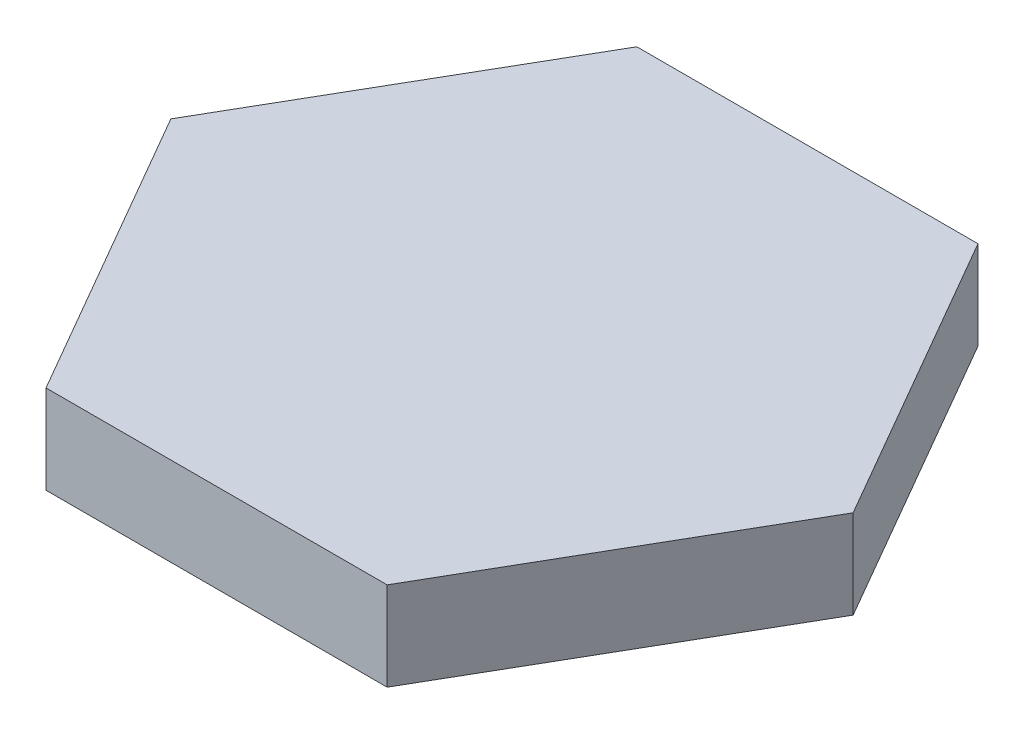
from build123d import *

# Parameters (mm, degrees)
BOSS_EXTRUDE1_DEPTH = 19.05
SKETCH4_W           = 95.25
SKETCH4_H           = 28.575
CUT_EXTRUDE3_DEPTH  = 6.35
SKETCH3_W           = 76.2
SKETCH3_H           = 38.1
CUT_EXTRUDE4_DEPTH  = 12.7
SKETCH6_W           = 0.610576923
SKETCH6_H           = 4.7625
CUT_EXTRUDE5_DEPTH  = 3.175
CUT_EXTRUDE6_DEPTH  = 3.175


with BuildPart() as part:
    # Sketch1 → Boss-Extrude1 (new body)
    with BuildSketch(Plane(origin=(0, 0, 0), x_dir=(1, 0, 0), z_dir=(0, 1, 0))):
        Polygon((73.323484187, 0), (36.661742094, 63.5), (-36.661742094, 63.5), (-73.323484187, 0), (-36.661742094, -63.5), (36.661742094, -63.5), align=None)
    extrude(amount=BOSS_EXTRUDE1_DEPTH)

    # Sketch4 → Cut-Extrude3 (cut)
    with BuildSketch(Plane(origin=(0, 0, 0), x_dir=(1, 0, 0), z_dir=(0, 1, 0))):
        with Locations((0, 17.4625)):
            Rectangle(SKETCH4_W, SKETCH4_H)
    extrude(amount=CUT_EXTRUDE3_DEPTH, mode=Mode.SUBTRACT)

    # Sketch3 → Cut-Extrude4 (cut)
    with BuildSketch(Plane(origin=(0, 0, 0), x_dir=(1, 0, 0), z_dir=(0, 1, 0))):
        with Locations((0, -28.575)):
            Rectangle(SKETCH3_W, SKETCH3_H)
    extrude(amount=CUT_EXTRUDE4_DEPTH, mode=Mode.SUBTRACT)

    # Sketch6 → Cut-Extrude5 (cut)
    # profile 1 of 18: a face of its own
    with BuildSketch(Plane(origin=(0, 0, 0), x_dir=(1, 0, 0), z_dir=(0, 1, 0))):
        with BuildLine():
            Line((20.866365512, 53.511750288), (19.898982699, 53.511750288))
            add(Edge.make_bspline(
                [(19.898982699, 53.511750288), (19.851586214, 53.511587608), (19.759587489, 53.511271838), (19.625647677, 53.503009571), (19.499663792, 53.491635716), (19.381307056, 53.477303088), (19.271347467, 53.455634756), (19.16917516, 53.431522051), (19.0750815, 53.401904186), (18.962095003, 53.356531644), (18.832868198, 53.289631985), (18.69589486, 53.189145374), (18.576765847, 53.071499576), (18.478226724, 52.937076143), (18.400272824, 52.791249582), (18.342995904, 52.638064308), (18.308725921, 52.478461451), (18.30421141, 52.369942387), (18.301942435, 52.31540113)],
                knots=[0, 0, 0, 0, 1.007958579, 1.956493294, 2.853051435, 3.69876748, 4.490758369, 5.235590101, 5.930857791, 6.586533057, 7.824014415, 9.014592828, 10.186442765, 11.371570779, 12.545761065, 13.692928573, 14.840474926, 16, 16, 16, 16], degree=3))
            add(Edge.make_bspline(
                [(18.301942435, 52.31540113), (18.303889308, 52.264406377), (18.307737058, 52.163621643), (18.335076773, 52.015026221), (18.380964508, 51.872305504), (18.445006368, 51.737690061), (18.522388054, 51.613392025), (18.617757468, 51.507499542), (18.724972896, 51.417295405), (18.806691111, 51.373688668), (18.84764556, 51.351834423)],
                knots=[0, 0, 0, 0, 1.049068526, 2.073352407, 3.097740801, 4.125217979, 5.134529868, 6.0985968, 7.047080017, 8, 8, 8, 8], degree=3))
            add(Edge.make_bspline(
                [(18.84764556, 51.351834423), (18.798924943, 51.335658362), (18.704131168, 51.30418524), (18.571383545, 51.24138005), (18.4511955, 51.168137985), (18.34474718, 51.082497356), (18.251440923, 50.987483781), (18.168266104, 50.885759414), (18.09735568, 50.775737975), (18.03970798, 50.657857676), (17.992155163, 50.535283849), (17.960445645, 50.407311914), (17.939250044, 50.276080553), (17.936821648, 50.187052423), (17.935596281, 50.142128894)],
                knots=[0, 0, 0, 0, 1.133419977, 2.205250392, 3.236826218, 4.236512947, 5.215313127, 6.174419893, 7.135300951, 8.100002318, 9.069604306, 10.034177721, 11.008047523, 12, 12, 12, 12], degree=3))
            add(Edge.make_bspline(
                [(17.935596281, 50.142128894), (17.936872269, 50.095633599), (17.939392709, 50.003792116), (17.959680911, 49.868348792), (17.994647996, 49.738223937), (18.041103654, 49.6120896), (18.102942515, 49.491530593), (18.177735654, 49.375531414), (18.266200633, 49.264605809), (18.366479606, 49.159204477), (18.47886461, 49.06266651), (18.60216824, 48.978737894), (18.73523332, 48.907543146), (18.878033461, 48.849022162), (19.031383484, 48.80474193), (19.194090632, 48.772201971), (19.366500378, 48.75312857), (19.484569675, 48.750563824), (19.545038889, 48.749250288)],
                knots=[0, 0, 0, 0, 0.936774787, 1.85039767, 2.752028152, 3.648404466, 4.554125646, 5.47676296, 6.425627069, 7.40928418, 8.404729492, 9.405524488, 10.409085955, 11.440939351, 12.509690097, 13.620780345, 14.781482169, 16, 16, 16, 16], degree=3))
            Line((19.545038889, 48.749250288), (20.866365512, 48.749250288))
            Line((20.866365512, 48.749250288), (20.866365512, 53.511750288))
        make_face()
        with BuildLine():
            Line((20.255788589, 52.962231058), (20.255788589, 51.557904135))
            Line((20.255788589, 51.557904135), (20.102190331, 51.557904135))
            add(Edge.make_bspline(
                [(20.102190331, 51.557904135), (20.062431238, 51.557874126), (19.986060393, 51.557816484), (19.875712068, 51.56330555), (19.773863572, 51.569443079), (19.680254897, 51.578784742), (19.595375609, 51.59145761), (19.518340766, 51.605031204), (19.450275796, 51.623217706), (19.371287704, 51.649521764), (19.283905841, 51.691296849), (19.189723404, 51.752774943), (19.107627684, 51.827163087), (19.038446319, 51.913106965), (18.981670358, 52.007213477), (18.94168633, 52.108135126), (18.916439625, 52.213989765), (18.913839272, 52.286319474), (18.912519358, 52.323033341)],
                knots=[0, 0, 0, 0, 1.189795604, 2.285406617, 3.306016107, 4.243629591, 5.09972607, 5.874440047, 6.583200089, 7.20625147, 8.364329942, 9.470433385, 10.562068177, 11.665054906, 12.761988123, 13.838370909, 14.902777763, 16, 16, 16, 16], degree=3))
            add(Edge.make_bspline(
                [(18.912519358, 52.323033341), (18.912859926, 52.347251789), (18.913526627, 52.394662189), (18.924829827, 52.463244507), (18.940563078, 52.528482879), (18.964683627, 52.589080543), (18.994438497, 52.646194891), (19.030939327, 52.699391029), (19.075318704, 52.747607726), (19.125093854, 52.7932342), (19.182901463, 52.83375287), (19.249400676, 52.867520588), (19.323528645, 52.89778104), (19.406635788, 52.920633198), (19.497968354, 52.940184479), (19.597840189, 52.952975404), (19.706151844, 52.960500498), (19.780988296, 52.961640073), (19.819798504, 52.962231058)],
                knots=[0, 0, 0, 0, 0.920588044, 1.802157111, 2.638793445, 3.470424406, 4.277107445, 5.086238418, 5.917516993, 6.765890369, 7.652348103, 8.594329737, 9.598999334, 10.694623565, 11.869668103, 13.151790333, 14.522917531, 16, 16, 16, 16], degree=3))
            Line((19.819798504, 52.962231058), (20.255788589, 52.962231058))
        make_face(mode=Mode.SUBTRACT)
        with BuildLine():
            Line((20.255788589, 51.008384904), (20.255788589, 49.298769519))
            Line((20.255788589, 49.298769519), (19.788315632, 49.298769519))
            add(Edge.make_bspline(
                [(19.788315632, 49.298769519), (19.747292136, 49.299303821), (19.668090642, 49.300335365), (19.553825485, 49.303464679), (19.448206535, 49.311385556), (19.351454494, 49.321647166), (19.263085161, 49.334465521), (19.184305928, 49.351996688), (19.113513011, 49.37051582), (19.032033776, 49.400770755), (18.940844236, 49.447693206), (18.841692323, 49.515659816), (18.755607941, 49.598819644), (18.681508258, 49.692873503), (18.621182829, 49.795435469), (18.5782376, 49.903902306), (18.550987932, 50.016134404), (18.547783628, 50.092367321), (18.546173204, 50.130680577)],
                knots=[0, 0, 0, 0, 1.163785926, 2.246848597, 3.241725633, 4.167152819, 5.00659376, 5.772700295, 6.455464292, 7.08048881, 8.234268396, 9.355318846, 10.478218647, 11.615125307, 12.742977958, 13.840148171, 14.914498376, 16, 16, 16, 16], degree=3))
            add(Edge.make_bspline(
                [(18.546173204, 50.130680577), (18.548087506, 50.178640159), (18.551847241, 50.272833901), (18.590172333, 50.408485988), (18.650109104, 50.534915653), (18.733764976, 50.650332052), (18.838217651, 50.753072914), (18.962980246, 50.838448311), (19.106258424, 50.905970108), (19.209981511, 50.935749092), (19.263601089, 50.951143317)],
                knots=[0, 0, 0, 0, 0.973192407, 1.911372656, 2.842841623, 3.806662698, 4.794486549, 5.808057144, 6.866876674, 8, 8, 8, 8], degree=3))
            add(Edge.make_bspline(
                [(19.263601089, 50.951143317), (19.285816991, 50.955848809), (19.33351578, 50.965951764), (19.411354784, 50.976582732), (19.499666101, 50.987691725), (19.599385912, 50.994303899), (19.70999217, 51.001789761), (19.83187834, 51.004595822), (19.964791773, 51.008019406), (20.057029852, 51.008259764), (20.105052411, 51.008384904)],
                knots=[0, 0, 0, 0, 0.644909758, 1.384657469, 2.230684102, 3.173004705, 4.222865052, 5.379792601, 6.635823043, 8, 8, 8, 8], degree=3))
            Line((20.105052411, 51.008384904), (20.255788589, 51.008384904))
        make_face(mode=Mode.SUBTRACT)
    # profile 2 of 18: a face of its own
    with BuildSketch(Plane(origin=(0, 0, 0), x_dir=(1, 0, 0), z_dir=(0, 1, 0))):
        with BuildLine():
            Line((14.231111605, 49.970404135), (13.722615512, 49.727127392))
            add(Edge.make_bspline(
                [(13.722615512, 49.727127392), (13.754763219, 49.66870298), (13.81736802, 49.554926637), (13.924194875, 49.397814542), (14.040129036, 49.259643245), (14.164043657, 49.138883538), (14.297484677, 49.035563926), (14.438050343, 48.943902358), (14.588722041, 48.86704461), (14.747565962, 48.801349151), (14.916667223, 48.750794056), (15.095817634, 48.714878987), (15.285383284, 48.692506369), (15.415313256, 48.689653386), (15.481840271, 48.688192596)],
                knots=[0, 0, 0, 0, 1.110387997, 2.162381809, 3.158716456, 4.110235088, 5.03849693, 5.965639636, 6.901458115, 7.851707839, 8.825366416, 9.836184406, 10.892078622, 12, 12, 12, 12], degree=3))
            add(Edge.make_bspline(
                [(15.481840271, 48.688192596), (15.552217795, 48.689642498), (15.689690453, 48.692474678), (15.889513455, 48.720314145), (16.078065061, 48.762442468), (16.254662239, 48.823457529), (16.418623355, 48.903594669), (16.571904852, 48.999280608), (16.712705263, 49.113489234), (16.839680021, 49.244297342), (16.952471908, 49.385571691), (17.053278157, 49.53174654), (17.135730319, 49.684288464), (17.205369495, 49.840253242), (17.258975486, 50.001323), (17.296955788, 50.16679164), (17.320806448, 50.337009782), (17.323603317, 50.452108953), (17.325019358, 50.510383101)],
                knots=[0, 0, 0, 0, 1.164566152, 2.274817246, 3.333639364, 4.359360714, 5.360157823, 6.349126428, 7.344925074, 8.35392925, 9.361228562, 10.335284257, 11.289572886, 12.22779236, 13.160187688, 14.095091993, 15.035554391, 16, 16, 16, 16], degree=3))
            add(Edge.make_bspline(
                [(17.325019358, 50.510383101), (17.323779529, 50.564828882), (17.321320358, 50.672820763), (17.30034598, 50.832308892), (17.268371666, 50.987573168), (17.222313377, 51.137978781), (17.162704506, 51.283790454), (17.089992306, 51.425210996), (17.004127156, 51.562200863), (16.937781281, 51.648107236), (16.904293697, 51.691467836)],
                knots=[0, 0, 0, 0, 1.021096707, 2.025320431, 3.012923591, 3.992437812, 4.971861174, 5.964497656, 6.972595394, 8, 8, 8, 8], degree=3))
            add(Edge.make_bspline(
                [(16.904293697, 51.691467836), (16.859008166, 51.74407787), (16.769748677, 51.847774231), (16.617633015, 51.982648636), (16.454614104, 52.097405861), (16.279617849, 52.190041334), (16.093941714, 52.263643972), (15.89652541, 52.314532885), (15.687952193, 52.34575658), (15.54523573, 52.349659523), (15.472300007, 52.351654135)],
                knots=[0, 0, 0, 0, 1.018725525, 2.007946416, 2.977291296, 3.940674949, 4.909614547, 5.904411593, 6.929042575, 8, 8, 8, 8], degree=3))
            add(Edge.make_bspline(
                [(15.472300007, 52.351654135), (15.3936286, 52.349841396), (15.240033201, 52.346302265), (15.016580591, 52.312808449), (14.805817403, 52.259902759), (14.608272822, 52.184155188), (14.42354747, 52.087021398), (14.251690627, 51.968897992), (14.092374154, 51.829091631), (14.000218451, 51.720680269), (13.953489911, 51.665709122)],
                knots=[0, 0, 0, 0, 1.092510559, 2.132980742, 3.131821249, 4.106721871, 5.065344059, 6.025034973, 6.998572742, 8, 8, 8, 8], degree=3))
            add(Edge.make_bspline(
                [(13.953489911, 51.665709122), (13.920772251, 51.623092286), (13.855546567, 51.538131677), (13.77383197, 51.398916779), (13.7027624, 51.252708699), (13.644215803, 51.097603718), (13.600191422, 50.933787018), (13.566138722, 50.762430704), (13.546502865, 50.582692755), (13.542456559, 50.460181956), (13.540396461, 50.397807981)],
                knots=[0, 0, 0, 0, 0.947891001, 1.889708495, 2.844047414, 3.816063809, 4.811874475, 5.836031954, 6.898258033, 8, 8, 8, 8], degree=3))
            Line((13.540396461, 50.397807981), (16.715396461, 50.397807981))
            add(Edge.make_bspline(
                [(16.715396461, 50.397807981), (16.713758537, 50.357332491), (16.710542026, 50.277847822), (16.690273416, 50.161765182), (16.6621493, 50.050410668), (16.622737834, 49.943957078), (16.572845149, 49.842337199), (16.512668685, 49.745617648), (16.441298205, 49.654533275), (16.360743284, 49.569339527), (16.272850572, 49.491826723), (16.179988035, 49.423723878), (16.082854929, 49.365524891), (15.980844401, 49.319336771), (15.874937518, 49.282271853), (15.764807722, 49.257244885), (15.650623065, 49.239774441), (15.572859163, 49.238406629), (15.533357699, 49.237711827)],
                knots=[0, 0, 0, 0, 1.056285998, 2.074305788, 3.068874036, 4.051103373, 5.031155672, 6.019259974, 7.018838325, 8.046424154, 9.075617995, 10.073437039, 11.048590896, 12.025474346, 12.991505956, 13.972050267, 14.969869311, 16, 16, 16, 16], degree=3))
            add(Edge.make_bspline(
                [(15.533357699, 49.237711827), (15.491007854, 49.238508137), (15.406664692, 49.240094054), (15.281793632, 49.256552089), (15.158708721, 49.279620004), (15.039484392, 49.314577148), (14.925023131, 49.355495199), (14.81889984, 49.404335474), (14.722045636, 49.458652736), (14.630748857, 49.521489743), (14.539794359, 49.600273293), (14.443971735, 49.701581622), (14.33941155, 49.827139296), (14.268858156, 49.920471021), (14.231111605, 49.970404135)],
                knots=[0, 0, 0, 0, 0.974501181, 1.940798391, 2.895710587, 3.855187413, 4.797895034, 5.692306932, 6.541458453, 7.351844759, 8.239729442, 9.306468335, 10.558942083, 12, 12, 12, 12], degree=3))
        make_face()
        with BuildLine():
            add(Edge.make_bspline(
                [(14.150019358, 50.947327211), (14.165491331, 50.986770516), (14.196349083, 51.065437384), (14.255758505, 51.177113279), (14.326102161, 51.281406366), (14.405412383, 51.379906958), (14.49773506, 51.470532584), (14.604560501, 51.55141207), (14.724710937, 51.624747816), (14.858220829, 51.686242761), (14.999815571, 51.737547948), (15.146685486, 51.775146929), (15.297337975, 51.797567602), (15.399083434, 51.800604486), (15.450357399, 51.802134904)],
                knots=[0, 0, 0, 0, 0.917468198, 1.829825112, 2.733739057, 3.639830069, 4.565591991, 5.528900948, 6.536885056, 7.609579627, 8.708054817, 9.795976896, 10.889296829, 12, 12, 12, 12], degree=3))
            add(Edge.make_bspline(
                [(15.450357399, 51.802134904), (15.489507595, 51.801147229), (15.567080434, 51.799190235), (15.681711868, 51.785742572), (15.792841, 51.762901116), (15.900416087, 51.730202123), (16.004356583, 51.68809119), (16.105252652, 51.637167681), (16.202726431, 51.577283969), (16.263877626, 51.530765487), (16.2946708, 51.507340733)],
                knots=[0, 0, 0, 0, 1.030056501, 2.040970785, 3.032161429, 4.011555994, 4.995123754, 5.979296403, 6.982458509, 8, 8, 8, 8], degree=3))
            add(Edge.make_bspline(
                [(16.2946708, 51.507340733), (16.333770864, 51.472921311), (16.413791728, 51.402479689), (16.513128939, 51.27025498), (16.602493102, 51.118660015), (16.647274326, 51.005935526), (16.670557218, 50.947327211)],
                knots=[0, 0, 0, 0, 0.913853049, 1.870260628, 2.892694598, 4, 4, 4, 4], degree=3))
            Line((16.670557218, 50.947327211), (14.150019358, 50.947327211))
        make_face(mode=Mode.SUBTRACT)
    # profile 3 of 18: a face of its own
    with BuildSketch(Plane(origin=(0, 0, 0), x_dir=(1, 0, 0), z_dir=(0, 1, 0))):
        with BuildLine():
            Line((12.806750127, 52.290596442), (12.196173204, 52.290596442))
            Line((12.196173204, 52.290596442), (12.196173204, 51.67429536))
            add(Edge.make_bspline(
                [(12.196173204, 51.67429536), (12.186820764, 51.701837203), (12.168314967, 51.756334611), (12.131976624, 51.833968294), (12.087616013, 51.906135837), (12.036029255, 51.97288361), (11.97745386, 52.034554615), (11.911160636, 52.090155388), (11.837169348, 52.139533078), (11.730173251, 52.199233589), (11.586277043, 52.259564289), (11.406001517, 52.313361029), (11.217555141, 52.345860726), (11.08962942, 52.349702222), (11.024628733, 52.351654135)],
                knots=[0, 0, 0, 0, 0.721725204, 1.428087222, 2.122703896, 2.820677415, 3.518695583, 4.230332313, 4.96387863, 5.723801269, 7.269448623, 8.825705575, 10.387100582, 12, 12, 12, 12], degree=3))
            add(Edge.make_bspline(
                [(11.024628733, 52.351654135), (10.988977063, 52.35130692), (10.918464949, 52.350620197), (10.814396335, 52.339029847), (10.713062563, 52.32387837), (10.615802632, 52.299235725), (10.521090886, 52.270000311), (10.430262837, 52.23241351), (10.341593462, 52.189974135), (10.258274345, 52.13872519), (10.178350912, 52.084012316), (10.10379226, 52.024671077), (10.034552739, 51.961598443), (9.97193834, 51.894064445), (9.915002603, 51.822537112), (9.863626494, 51.747804187), (9.818559351, 51.66842179), (9.777738083, 51.584981658), (9.743238421, 51.493201521), (9.712354643, 51.392060963), (9.68863153, 51.279178819), (9.667376453, 51.156092966), (9.651351886, 51.022024989), (9.640516608, 50.876864018), (9.63220058, 50.720681518), (9.631903436, 50.612794187), (9.631750127, 50.557130397)],
                knots=[0, 0, 0, 0, 0.988922562, 1.955897754, 2.903462704, 3.830413303, 4.737655562, 5.652253036, 6.556226254, 7.462953132, 8.363948131, 9.243414842, 10.105524893, 10.96114924, 11.796501801, 12.641129127, 13.475361786, 14.328067462, 15.216523844, 16.193837025, 17.260347067, 18.415405116, 19.660191975, 21.00599444, 22.455261645, 24, 24, 24, 24], degree=3))
            Line((9.631750127, 50.557130397), (9.631750127, 48.749250288))
            Line((9.631750127, 48.749250288), (10.24232705, 48.749250288))
            Line((10.24232705, 48.749250288), (10.24232705, 50.415934483))
            add(Edge.make_bspline(
                [(10.24232705, 50.415934483), (10.24260389, 50.461409119), (10.243134363, 50.548546173), (10.244542271, 50.673238234), (10.248912234, 50.786106619), (10.252542892, 50.887050558), (10.261158761, 50.975977849), (10.268080767, 51.053394176), (10.276968725, 51.119146181), (10.285969277, 51.158531468), (10.290028372, 51.176293558)],
                knots=[0, 0, 0, 0, 1.430152756, 2.740413335, 3.921188358, 4.982454356, 5.915965761, 6.729973834, 7.427239984, 8, 8, 8, 8], degree=3))
            add(Edge.make_bspline(
                [(10.290028372, 51.176293558), (10.303145013, 51.226080136), (10.328274097, 51.321462109), (10.388690658, 51.451520324), (10.467394092, 51.560627587), (10.562231428, 51.650347059), (10.674561119, 51.718975281), (10.802934565, 51.767626587), (10.947261436, 51.797505934), (11.048963652, 51.800550205), (11.101904875, 51.802134904)],
                knots=[0, 0, 0, 0, 1.0975214, 2.10265016, 3.040914952, 3.953360464, 4.870791917, 5.831382138, 6.871123111, 8, 8, 8, 8], degree=3))
            add(Edge.make_bspline(
                [(11.101904875, 51.802134904), (11.130570606, 51.801443555), (11.187496551, 51.800070638), (11.271961563, 51.787724724), (11.354848147, 51.770273438), (11.435850767, 51.743918141), (11.515247565, 51.710297026), (11.593436091, 51.669636317), (11.668976913, 51.620039453), (11.742844705, 51.565291094), (11.813674292, 51.505003055), (11.876949977, 51.437240743), (11.937060672, 51.367505342), (11.988210605, 51.290783234), (12.03528185, 51.211242588), (12.075548935, 51.126230761), (12.10987633, 51.0368735), (12.12792027, 50.974818361), (12.137023565, 50.943511106)],
                knots=[0, 0, 0, 0, 0.951460867, 1.889461998, 2.829957029, 3.761813917, 4.713157544, 5.691039254, 6.68414425, 7.710717288, 8.74400498, 9.767367674, 10.786963074, 11.797603157, 12.824665026, 13.854492557, 14.917576362, 16, 16, 16, 16], degree=3))
            add(Edge.make_bspline(
                [(12.137023565, 50.943511106), (12.142157247, 50.921953726), (12.153473559, 50.874434224), (12.163277956, 50.795404078), (12.174750185, 50.703330953), (12.181192214, 50.597544518), (12.188351648, 50.478333563), (12.192789761, 50.345681017), (12.195700732, 50.199702225), (12.196011195, 50.097927471), (12.196173204, 50.044818197)],
                knots=[0, 0, 0, 0, 0.589044374, 1.298446081, 2.115829079, 3.057219828, 4.116258555, 5.292827855, 6.587312255, 8, 8, 8, 8], degree=3))
            Line((12.196173204, 50.044818197), (12.196173204, 48.749250288))
            Line((12.196173204, 48.749250288), (12.806750127, 48.749250288))
            Line((12.806750127, 48.749250288), (12.806750127, 52.290596442))
        make_face()
    # profile 4 of 18: a face of its own
    with BuildSketch(Plane(origin=(0, 0, 0), x_dir=(1, 0, 0), z_dir=(0, 1, 0))):
        Polygon((9.021173204, 52.290596442), (6.27357705, 52.290596442), (8.236963468, 49.298769519), (6.334634742, 49.298769519), (6.334634742, 48.749250288), (9.204346281, 48.749250288), (7.240959863, 51.741077211), (9.021173204, 51.741077211), align=None)
    # profile 5 of 18: a face of its own
    with BuildSketch(Plane(origin=(0, 0, 0), x_dir=(1, 0, 0), z_dir=(0, 1, 0))):
        with BuildLine():
            Line((2.935438528, 49.970404135), (2.426942435, 49.727127392))
            add(Edge.make_bspline(
                [(2.426942435, 49.727127392), (2.459090143, 49.66870298), (2.521694943, 49.554926637), (2.628521798, 49.397814542), (2.744455959, 49.259643245), (2.86837058, 49.138883538), (3.0018116, 49.035563926), (3.142377266, 48.943902358), (3.293048964, 48.86704461), (3.451892886, 48.801349151), (3.620994146, 48.750794056), (3.800144557, 48.714878987), (3.989710207, 48.692506369), (4.119640179, 48.689653386), (4.186167194, 48.688192596)],
                knots=[0, 0, 0, 0, 1.110387997, 2.162381809, 3.158716456, 4.110235088, 5.03849693, 5.965639636, 6.901458115, 7.851707839, 8.825366416, 9.836184406, 10.892078622, 12, 12, 12, 12], degree=3))
            add(Edge.make_bspline(
                [(4.186167194, 48.688192596), (4.256544718, 48.689642498), (4.394017376, 48.692474678), (4.593840378, 48.720314145), (4.782391984, 48.762442468), (4.958989162, 48.823457529), (5.122950278, 48.903594669), (5.276231775, 48.999280608), (5.417032186, 49.113489234), (5.544006944, 49.244297342), (5.656798831, 49.385571691), (5.75760508, 49.53174654), (5.840057242, 49.684288464), (5.909696418, 49.840253242), (5.963302409, 50.001323), (6.001282712, 50.16679164), (6.025133371, 50.337009782), (6.02793024, 50.452108953), (6.029346281, 50.510383101)],
                knots=[0, 0, 0, 0, 1.164566152, 2.274817246, 3.333639364, 4.359360714, 5.360157823, 6.349126428, 7.344925074, 8.35392925, 9.361228562, 10.335284257, 11.289572886, 12.22779236, 13.160187688, 14.095091993, 15.035554391, 16, 16, 16, 16], degree=3))
            add(Edge.make_bspline(
                [(6.029346281, 50.510383101), (6.028106452, 50.564828882), (6.025647281, 50.672820763), (6.004672903, 50.832308892), (5.97269859, 50.987573168), (5.9266403, 51.137978781), (5.867031429, 51.283790454), (5.794319229, 51.425210996), (5.708454079, 51.562200863), (5.642108204, 51.648107236), (5.60862062, 51.691467836)],
                knots=[0, 0, 0, 0, 1.021096707, 2.025320431, 3.012923591, 3.992437812, 4.971861174, 5.964497656, 6.972595394, 8, 8, 8, 8], degree=3))
            add(Edge.make_bspline(
                [(5.60862062, 51.691467836), (5.563335089, 51.74407787), (5.4740756, 51.847774231), (5.321959938, 51.982648636), (5.158941027, 52.097405861), (4.983944773, 52.190041334), (4.798268637, 52.263643972), (4.600852333, 52.314532885), (4.392279116, 52.34575658), (4.249562653, 52.349659523), (4.17662693, 52.351654135)],
                knots=[0, 0, 0, 0, 1.018725525, 2.007946416, 2.977291296, 3.940674949, 4.909614547, 5.904411593, 6.929042575, 8, 8, 8, 8], degree=3))
            add(Edge.make_bspline(
                [(4.17662693, 52.351654135), (4.097955523, 52.349841396), (3.944360124, 52.346302265), (3.720907514, 52.312808449), (3.510144326, 52.259902759), (3.312599745, 52.184155188), (3.127874393, 52.087021398), (2.95601755, 51.968897992), (2.796701077, 51.829091631), (2.704545374, 51.720680269), (2.657816834, 51.665709122)],
                knots=[0, 0, 0, 0, 1.092510559, 2.132980742, 3.131821249, 4.106721871, 5.065344059, 6.025034973, 6.998572742, 8, 8, 8, 8], degree=3))
            add(Edge.make_bspline(
                [(2.657816834, 51.665709122), (2.625099174, 51.623092286), (2.55987349, 51.538131677), (2.478158893, 51.398916779), (2.407089323, 51.252708699), (2.348542726, 51.097603718), (2.304518345, 50.933787018), (2.270465645, 50.762430704), (2.250829788, 50.582692755), (2.246783482, 50.460181956), (2.244723384, 50.397807981)],
                knots=[0, 0, 0, 0, 0.947891001, 1.889708495, 2.844047414, 3.816063809, 4.811874475, 5.836031954, 6.898258033, 8, 8, 8, 8], degree=3))
            Line((2.244723384, 50.397807981), (5.419723384, 50.397807981))
            add(Edge.make_bspline(
                [(5.419723384, 50.397807981), (5.41808546, 50.357332491), (5.414868949, 50.277847822), (5.394600339, 50.161765182), (5.366476223, 50.050410668), (5.327064757, 49.943957078), (5.277172072, 49.842337199), (5.216995608, 49.745617648), (5.145625128, 49.654533275), (5.065070207, 49.569339527), (4.977177495, 49.491826723), (4.884314958, 49.423723878), (4.787181852, 49.365524891), (4.685171324, 49.319336771), (4.579264441, 49.282271853), (4.469134645, 49.257244885), (4.354949988, 49.239774441), (4.277186086, 49.238406629), (4.237684622, 49.237711827)],
                knots=[0, 0, 0, 0, 1.056285998, 2.074305788, 3.068874036, 4.051103373, 5.031155672, 6.019259974, 7.018838325, 8.046424154, 9.075617995, 10.073437039, 11.048590896, 12.025474346, 12.991505956, 13.972050267, 14.969869311, 16, 16, 16, 16], degree=3))
            add(Edge.make_bspline(
                [(4.237684622, 49.237711827), (4.195334777, 49.238508137), (4.110991615, 49.240094054), (3.986120555, 49.256552089), (3.863035644, 49.279620004), (3.743811315, 49.314577148), (3.629350054, 49.355495199), (3.523226763, 49.404335474), (3.426372559, 49.458652736), (3.33507578, 49.521489743), (3.244121282, 49.600273293), (3.148298658, 49.701581622), (3.043738473, 49.827139296), (2.973185079, 49.920471021), (2.935438528, 49.970404135)],
                knots=[0, 0, 0, 0, 0.974501181, 1.940798391, 2.895710587, 3.855187413, 4.797895034, 5.692306932, 6.541458453, 7.351844759, 8.239729442, 9.306468335, 10.558942083, 12, 12, 12, 12], degree=3))
        make_face()
        with BuildLine():
            add(Edge.make_bspline(
                [(2.854346281, 50.947327211), (2.869818254, 50.986770516), (2.900676006, 51.065437384), (2.960085428, 51.177113279), (3.030429084, 51.281406366), (3.109739306, 51.379906958), (3.202061983, 51.470532584), (3.308887424, 51.55141207), (3.42903786, 51.624747816), (3.562547752, 51.686242761), (3.704142494, 51.737547948), (3.851012409, 51.775146929), (4.001664898, 51.797567602), (4.103410357, 51.800604486), (4.154684322, 51.802134904)],
                knots=[0, 0, 0, 0, 0.917468198, 1.829825112, 2.733739057, 3.639830069, 4.565591991, 5.528900948, 6.536885056, 7.609579627, 8.708054817, 9.795976896, 10.889296829, 12, 12, 12, 12], degree=3))
            add(Edge.make_bspline(
                [(4.154684322, 51.802134904), (4.193834518, 51.801147229), (4.271407358, 51.799190235), (4.386038791, 51.785742572), (4.497167923, 51.762901116), (4.60474301, 51.730202123), (4.708683506, 51.68809119), (4.809579575, 51.637167681), (4.907053354, 51.577283969), (4.968204549, 51.530765487), (4.998997723, 51.507340733)],
                knots=[0, 0, 0, 0, 1.030056501, 2.040970785, 3.032161429, 4.011555994, 4.995123754, 5.979296403, 6.982458509, 8, 8, 8, 8], degree=3))
            add(Edge.make_bspline(
                [(4.998997723, 51.507340733), (5.038097787, 51.472921311), (5.118118651, 51.402479689), (5.217455862, 51.27025498), (5.306820025, 51.118660015), (5.351601249, 51.005935526), (5.374884141, 50.947327211)],
                knots=[0, 0, 0, 0, 0.913853049, 1.870260628, 2.892694598, 4, 4, 4, 4], degree=3))
            Line((5.374884141, 50.947327211), (2.854346281, 50.947327211))
        make_face(mode=Mode.SUBTRACT)
    # profile 6 of 18: a face of its own
    with BuildSketch(Plane(origin=(0, 0, 0), x_dir=(1, 0, 0), z_dir=(0, 1, 0))):
        with BuildLine():
            Line((1.51107705, 52.290596442), (0.900500127, 52.290596442))
            Line((0.900500127, 52.290596442), (0.900500127, 51.67429536))
            add(Edge.make_bspline(
                [(0.900500127, 51.67429536), (0.891147687, 51.701837203), (0.87264189, 51.756334611), (0.836303547, 51.833968294), (0.791942936, 51.906135837), (0.740356178, 51.97288361), (0.681780783, 52.034554615), (0.615487559, 52.090155388), (0.541496271, 52.139533078), (0.434500174, 52.199233589), (0.290603966, 52.259564289), (0.11032844, 52.313361029), (-0.078117936, 52.345860726), (-0.206043656, 52.349702222), (-0.271044344, 52.351654135)],
                knots=[0, 0, 0, 0, 0.721725204, 1.428087222, 2.122703896, 2.820677415, 3.518695583, 4.230332313, 4.96387863, 5.723801269, 7.269448623, 8.825705575, 10.387100582, 12, 12, 12, 12], degree=3))
            add(Edge.make_bspline(
                [(-0.271044344, 52.351654135), (-0.306696014, 52.35130692), (-0.377208128, 52.350620197), (-0.481276742, 52.339029847), (-0.582610513, 52.32387837), (-0.679870445, 52.299235725), (-0.774582191, 52.270000311), (-0.86541024, 52.23241351), (-0.954079615, 52.189974135), (-1.037398732, 52.13872519), (-1.117322165, 52.084012316), (-1.191880817, 52.024671077), (-1.261120338, 51.961598443), (-1.323734737, 51.894064445), (-1.380670474, 51.822537112), (-1.432046583, 51.747804187), (-1.477113726, 51.66842179), (-1.517934994, 51.584981658), (-1.552434656, 51.493201521), (-1.583318433, 51.392060963), (-1.607041547, 51.279178819), (-1.628296624, 51.156092966), (-1.644321191, 51.022024989), (-1.655156469, 50.876864018), (-1.663472497, 50.720681518), (-1.663769641, 50.612794187), (-1.66392295, 50.557130397)],
                knots=[0, 0, 0, 0, 0.988922562, 1.955897754, 2.903462704, 3.830413303, 4.737655562, 5.652253036, 6.556226254, 7.462953132, 8.363948131, 9.243414842, 10.105524893, 10.96114924, 11.796501801, 12.641129127, 13.475361786, 14.328067462, 15.216523844, 16.193837025, 17.260347067, 18.415405116, 19.660191975, 21.00599444, 22.455261645, 24, 24, 24, 24], degree=3))
            Line((-1.66392295, 50.557130397), (-1.66392295, 48.749250288))
            Line((-1.66392295, 48.749250288), (-1.053346027, 48.749250288))
            Line((-1.053346027, 48.749250288), (-1.053346027, 50.415934483))
            add(Edge.make_bspline(
                [(-1.053346027, 50.415934483), (-1.053069187, 50.461409119), (-1.052538714, 50.548546173), (-1.051130806, 50.673238234), (-1.046760843, 50.786106619), (-1.043130185, 50.887050558), (-1.034514316, 50.975977849), (-1.02759231, 51.053394176), (-1.018704352, 51.119146181), (-1.0097038, 51.158531468), (-1.005644705, 51.176293558)],
                knots=[0, 0, 0, 0, 1.430152756, 2.740413335, 3.921188358, 4.982454356, 5.915965761, 6.729973834, 7.427239984, 8, 8, 8, 8], degree=3))
            add(Edge.make_bspline(
                [(-1.005644705, 51.176293558), (-0.992528064, 51.226080136), (-0.96739898, 51.321462109), (-0.906982419, 51.451520324), (-0.828278985, 51.560627587), (-0.733441649, 51.650347059), (-0.621111957, 51.718975281), (-0.492738512, 51.767626587), (-0.348411641, 51.797505934), (-0.246709425, 51.800550205), (-0.193768202, 51.802134904)],
                knots=[0, 0, 0, 0, 1.0975214, 2.10265016, 3.040914952, 3.953360464, 4.870791917, 5.831382138, 6.871123111, 8, 8, 8, 8], degree=3))
            add(Edge.make_bspline(
                [(-0.193768202, 51.802134904), (-0.165102471, 51.801443555), (-0.108176526, 51.800070638), (-0.023711513, 51.787724724), (0.05917507, 51.770273438), (0.14017769, 51.743918141), (0.219574488, 51.710297026), (0.297763014, 51.669636317), (0.373303836, 51.620039453), (0.447171628, 51.565291094), (0.518001215, 51.505003055), (0.5812769, 51.437240743), (0.641387596, 51.367505342), (0.692537528, 51.290783234), (0.739608773, 51.211242588), (0.779875858, 51.126230761), (0.814203253, 51.0368735), (0.832247193, 50.974818361), (0.841350488, 50.943511106)],
                knots=[0, 0, 0, 0, 0.951460867, 1.889461998, 2.829957029, 3.761813917, 4.713157544, 5.691039254, 6.68414425, 7.710717288, 8.74400498, 9.767367674, 10.786963074, 11.797603157, 12.824665026, 13.854492557, 14.917576362, 16, 16, 16, 16], degree=3))
            add(Edge.make_bspline(
                [(0.841350488, 50.943511106), (0.84648417, 50.921953726), (0.857800482, 50.874434224), (0.867604879, 50.795404078), (0.879077108, 50.703330953), (0.885519137, 50.597544518), (0.892678571, 50.478333563), (0.897116684, 50.345681017), (0.900027655, 50.199702225), (0.900338118, 50.097927471), (0.900500127, 50.044818197)],
                knots=[0, 0, 0, 0, 0.589044374, 1.298446081, 2.115829079, 3.057219828, 4.116258555, 5.292827855, 6.587312255, 8, 8, 8, 8], degree=3))
            Line((0.900500127, 50.044818197), (0.900500127, 48.749250288))
            Line((0.900500127, 48.749250288), (1.51107705, 48.749250288))
            Line((1.51107705, 48.749250288), (1.51107705, 52.290596442))
        make_face()
    # profile 7 of 18: a face of its own
    with BuildSketch(Plane(origin=(0, 0, 0), x_dir=(1, 0, 0), z_dir=(0, 1, 0))):
        with BuildLine():
            Line((-5.49052301, 49.970404135), (-5.999019104, 49.727127392))
            add(Edge.make_bspline(
                [(-5.999019104, 49.727127392), (-5.966871396, 49.66870298), (-5.904266596, 49.554926637), (-5.79743974, 49.397814542), (-5.681505579, 49.259643245), (-5.557590958, 49.138883538), (-5.424149939, 49.035563926), (-5.283584272, 48.943902358), (-5.132912574, 48.86704461), (-4.974068653, 48.801349151), (-4.804967392, 48.750794056), (-4.625816981, 48.714878987), (-4.436251332, 48.692506369), (-4.30632136, 48.689653386), (-4.239794344, 48.688192596)],
                knots=[0, 0, 0, 0, 1.110387997, 2.162381809, 3.158716456, 4.110235088, 5.03849693, 5.965639636, 6.901458115, 7.851707839, 8.825366416, 9.836184406, 10.892078622, 12, 12, 12, 12], degree=3))
            add(Edge.make_bspline(
                [(-4.239794344, 48.688192596), (-4.169416821, 48.689642498), (-4.031944163, 48.692474678), (-3.83212116, 48.720314145), (-3.643569555, 48.762442468), (-3.466972376, 48.823457529), (-3.303011261, 48.903594669), (-3.149729763, 48.999280608), (-3.008929352, 49.113489234), (-2.881954594, 49.244297342), (-2.769162708, 49.385571691), (-2.668356458, 49.53174654), (-2.585904296, 49.684288464), (-2.51626512, 49.840253242), (-2.46265913, 50.001323), (-2.424678827, 50.16679164), (-2.400828167, 50.337009782), (-2.398031299, 50.452108953), (-2.396615258, 50.510383101)],
                knots=[0, 0, 0, 0, 1.164566152, 2.274817246, 3.333639364, 4.359360714, 5.360157823, 6.349126428, 7.344925074, 8.35392925, 9.361228562, 10.335284257, 11.289572886, 12.22779236, 13.160187688, 14.095091993, 15.035554391, 16, 16, 16, 16], degree=3))
            add(Edge.make_bspline(
                [(-2.396615258, 50.510383101), (-2.397855087, 50.564828882), (-2.400314257, 50.672820763), (-2.421288635, 50.832308892), (-2.453262949, 50.987573168), (-2.499321238, 51.137978781), (-2.55893011, 51.283790454), (-2.631642309, 51.425210996), (-2.71750746, 51.562200863), (-2.783853334, 51.648107236), (-2.817340919, 51.691467836)],
                knots=[0, 0, 0, 0, 1.021096707, 2.025320431, 3.012923591, 3.992437812, 4.971861174, 5.964497656, 6.972595394, 8, 8, 8, 8], degree=3))
            add(Edge.make_bspline(
                [(-2.817340919, 51.691467836), (-2.86262645, 51.74407787), (-2.951885938, 51.847774231), (-3.104001601, 51.982648636), (-3.267020511, 52.097405861), (-3.442016766, 52.190041334), (-3.627692901, 52.263643972), (-3.825109206, 52.314532885), (-4.033682423, 52.34575658), (-4.176398886, 52.349659523), (-4.249334609, 52.351654135)],
                knots=[0, 0, 0, 0, 1.018725525, 2.007946416, 2.977291296, 3.940674949, 4.909614547, 5.904411593, 6.929042575, 8, 8, 8, 8], degree=3))
            add(Edge.make_bspline(
                [(-4.249334609, 52.351654135), (-4.328006015, 52.349841396), (-4.481601414, 52.346302265), (-4.705054024, 52.312808449), (-4.915817212, 52.259902759), (-5.113361793, 52.184155188), (-5.298087146, 52.087021398), (-5.469943989, 51.968897992), (-5.629260461, 51.829091631), (-5.721416164, 51.720680269), (-5.768144705, 51.665709122)],
                knots=[0, 0, 0, 0, 1.092510559, 2.132980742, 3.131821249, 4.106721871, 5.065344059, 6.025034973, 6.998572742, 8, 8, 8, 8], degree=3))
            add(Edge.make_bspline(
                [(-5.768144705, 51.665709122), (-5.800862364, 51.623092286), (-5.866088049, 51.538131677), (-5.947802646, 51.398916779), (-6.018872216, 51.252708699), (-6.077418812, 51.097603718), (-6.121443193, 50.933787018), (-6.155495894, 50.762430704), (-6.175131751, 50.582692755), (-6.179178057, 50.460181956), (-6.181238154, 50.397807981)],
                knots=[0, 0, 0, 0, 0.947891001, 1.889708495, 2.844047414, 3.816063809, 4.811874475, 5.836031954, 6.898258033, 8, 8, 8, 8], degree=3))
            Line((-6.181238154, 50.397807981), (-3.006238154, 50.397807981))
            add(Edge.make_bspline(
                [(-3.006238154, 50.397807981), (-3.007876079, 50.357332491), (-3.01109259, 50.277847822), (-3.031361199, 50.161765182), (-3.059485315, 50.050410668), (-3.098896781, 49.943957078), (-3.148789466, 49.842337199), (-3.20896593, 49.745617648), (-3.280336411, 49.654533275), (-3.360891331, 49.569339527), (-3.448784043, 49.491826723), (-3.54164658, 49.423723878), (-3.638779686, 49.365524891), (-3.740790214, 49.319336771), (-3.846697098, 49.282271853), (-3.956826893, 49.257244885), (-4.07101155, 49.239774441), (-4.148775453, 49.238406629), (-4.188276916, 49.237711827)],
                knots=[0, 0, 0, 0, 1.056285998, 2.074305788, 3.068874036, 4.051103373, 5.031155672, 6.019259974, 7.018838325, 8.046424154, 9.075617995, 10.073437039, 11.048590896, 12.025474346, 12.991505956, 13.972050267, 14.969869311, 16, 16, 16, 16], degree=3))
            add(Edge.make_bspline(
                [(-4.188276916, 49.237711827), (-4.230626761, 49.238508137), (-4.314969923, 49.240094054), (-4.439840984, 49.256552089), (-4.562925895, 49.279620004), (-4.682150223, 49.314577148), (-4.796611484, 49.355495199), (-4.902734775, 49.404335474), (-4.99958898, 49.458652736), (-5.090885758, 49.521489743), (-5.181840256, 49.600273293), (-5.277662881, 49.701581622), (-5.382223065, 49.827139296), (-5.45277646, 49.920471021), (-5.49052301, 49.970404135)],
                knots=[0, 0, 0, 0, 0.974501181, 1.940798391, 2.895710587, 3.855187413, 4.797895034, 5.692306932, 6.541458453, 7.351844759, 8.239729442, 9.306468335, 10.558942083, 12, 12, 12, 12], degree=3))
        make_face()
        with BuildLine():
            add(Edge.make_bspline(
                [(-5.571615258, 50.947327211), (-5.556143284, 50.986770516), (-5.525285532, 51.065437384), (-5.465876111, 51.177113279), (-5.395532454, 51.281406366), (-5.316222233, 51.379906958), (-5.223899555, 51.470532584), (-5.117074114, 51.55141207), (-4.996923678, 51.624747816), (-4.863413786, 51.686242761), (-4.721819045, 51.737547948), (-4.574949129, 51.775146929), (-4.42429664, 51.797567602), (-4.322551182, 51.800604486), (-4.271277217, 51.802134904)],
                knots=[0, 0, 0, 0, 0.917468198, 1.829825112, 2.733739057, 3.639830069, 4.565591991, 5.528900948, 6.536885056, 7.609579627, 8.708054817, 9.795976896, 10.889296829, 12, 12, 12, 12], degree=3))
            add(Edge.make_bspline(
                [(-4.271277217, 51.802134904), (-4.23212702, 51.801147229), (-4.154554181, 51.799190235), (-4.039922748, 51.785742572), (-3.928793615, 51.762901116), (-3.821218528, 51.730202123), (-3.717278033, 51.68809119), (-3.616381964, 51.637167681), (-3.518908184, 51.577283969), (-3.45775699, 51.530765487), (-3.426963815, 51.507340733)],
                knots=[0, 0, 0, 0, 1.030056501, 2.040970785, 3.032161429, 4.011555994, 4.995123754, 5.979296403, 6.982458509, 8, 8, 8, 8], degree=3))
            add(Edge.make_bspline(
                [(-3.426963815, 51.507340733), (-3.387863751, 51.472921311), (-3.307842887, 51.402479689), (-3.208505677, 51.27025498), (-3.119141514, 51.118660015), (-3.074360289, 51.005935526), (-3.051077397, 50.947327211)],
                knots=[0, 0, 0, 0, 0.913853049, 1.870260628, 2.892694598, 4, 4, 4, 4], degree=3))
            Line((-3.051077397, 50.947327211), (-5.571615258, 50.947327211))
        make_face(mode=Mode.SUBTRACT)
    # profile 8 of 18: a face of its own
    with BuildSketch(Plane(origin=(0, 0, 0), x_dir=(1, 0, 0), z_dir=(0, 1, 0))):
        with BuildLine():
            Line((-8.929788335, 53.511750288), (-9.897171147, 53.511750288))
            add(Edge.make_bspline(
                [(-9.897171147, 53.511750288), (-9.944567632, 53.511587608), (-10.036566357, 53.511271838), (-10.17050617, 53.503009571), (-10.296490054, 53.491635716), (-10.414846791, 53.477303088), (-10.524806379, 53.455634756), (-10.626978686, 53.431522051), (-10.721072346, 53.401904186), (-10.834058843, 53.356531644), (-10.963285649, 53.289631985), (-11.100258986, 53.189145374), (-11.219387999, 53.071499576), (-11.317927122, 52.937076143), (-11.395881023, 52.791249582), (-11.453157942, 52.638064308), (-11.487427926, 52.478461451), (-11.491942436, 52.369942387), (-11.494211411, 52.31540113)],
                knots=[0, 0, 0, 0, 1.007958579, 1.956493294, 2.853051435, 3.69876748, 4.490758369, 5.235590101, 5.930857791, 6.586533057, 7.824014415, 9.014592828, 10.186442765, 11.371570779, 12.545761065, 13.692928573, 14.840474926, 16, 16, 16, 16], degree=3))
            add(Edge.make_bspline(
                [(-11.494211411, 52.31540113), (-11.492264538, 52.264406377), (-11.488416788, 52.163621643), (-11.461077074, 52.015026221), (-11.415189338, 51.872305504), (-11.351147478, 51.737690061), (-11.273765792, 51.613392025), (-11.178396378, 51.507499542), (-11.07118095, 51.417295405), (-10.989462735, 51.373688668), (-10.948508286, 51.351834423)],
                knots=[0, 0, 0, 0, 1.049068526, 2.073352407, 3.097740801, 4.125217979, 5.134529868, 6.0985968, 7.047080017, 8, 8, 8, 8], degree=3))
            add(Edge.make_bspline(
                [(-10.948508286, 51.351834423), (-10.997228903, 51.335658362), (-11.092022678, 51.30418524), (-11.224770301, 51.24138005), (-11.344958346, 51.168137985), (-11.451406666, 51.082497356), (-11.544712923, 50.987483781), (-11.627887742, 50.885759414), (-11.698798166, 50.775737975), (-11.756445867, 50.657857676), (-11.803998683, 50.535283849), (-11.835708201, 50.407311914), (-11.856903802, 50.276080553), (-11.859332198, 50.187052423), (-11.860557565, 50.142128894)],
                knots=[0, 0, 0, 0, 1.133419977, 2.205250392, 3.236826218, 4.236512947, 5.215313127, 6.174419893, 7.135300951, 8.100002318, 9.069604306, 10.034177721, 11.008047523, 12, 12, 12, 12], degree=3))
            add(Edge.make_bspline(
                [(-11.860557565, 50.142128894), (-11.859281577, 50.095633599), (-11.856761137, 50.003792116), (-11.836472935, 49.868348792), (-11.80150585, 49.738223937), (-11.755050193, 49.6120896), (-11.693211331, 49.491530593), (-11.618418192, 49.375531414), (-11.529953213, 49.264605809), (-11.42967424, 49.159204477), (-11.317289236, 49.06266651), (-11.193985606, 48.978737894), (-11.060920526, 48.907543146), (-10.918120385, 48.849022162), (-10.764770362, 48.80474193), (-10.602063214, 48.772201971), (-10.429653468, 48.75312857), (-10.311584171, 48.750563824), (-10.251114957, 48.749250288)],
                knots=[0, 0, 0, 0, 0.936774787, 1.85039767, 2.752028152, 3.648404466, 4.554125646, 5.47676296, 6.425627069, 7.40928418, 8.404729492, 9.405524488, 10.409085955, 11.440939351, 12.509690097, 13.620780345, 14.781482169, 16, 16, 16, 16], degree=3))
            Line((-10.251114957, 48.749250288), (-8.929788335, 48.749250288))
            Line((-8.929788335, 48.749250288), (-8.929788335, 53.511750288))
        make_face()
        with BuildLine():
            Line((-9.540365258, 52.962231058), (-9.540365258, 51.557904135))
            Line((-9.540365258, 51.557904135), (-9.693963515, 51.557904135))
            add(Edge.make_bspline(
                [(-9.693963515, 51.557904135), (-9.733722608, 51.557874126), (-9.810093453, 51.557816484), (-9.920441778, 51.56330555), (-10.022290275, 51.569443079), (-10.115898949, 51.578784742), (-10.200778238, 51.59145761), (-10.27781308, 51.605031204), (-10.34587805, 51.623217706), (-10.424866143, 51.649521764), (-10.512248005, 51.691296849), (-10.606430442, 51.752774943), (-10.688526162, 51.827163087), (-10.757707527, 51.913106965), (-10.814483489, 52.007213477), (-10.854467516, 52.108135126), (-10.879714221, 52.213989765), (-10.882314574, 52.286319474), (-10.883634488, 52.323033341)],
                knots=[0, 0, 0, 0, 1.189795604, 2.285406617, 3.306016107, 4.243629591, 5.09972607, 5.874440047, 6.583200089, 7.20625147, 8.364329942, 9.470433385, 10.562068177, 11.665054906, 12.761988123, 13.838370909, 14.902777763, 16, 16, 16, 16], degree=3))
            add(Edge.make_bspline(
                [(-10.883634488, 52.323033341), (-10.88329392, 52.347251789), (-10.882627219, 52.394662189), (-10.871324019, 52.463244507), (-10.855590768, 52.528482879), (-10.83147022, 52.589080543), (-10.801715349, 52.646194891), (-10.765214519, 52.699391029), (-10.720835142, 52.747607726), (-10.671059992, 52.7932342), (-10.613252383, 52.83375287), (-10.54675317, 52.867520588), (-10.472625202, 52.89778104), (-10.389518058, 52.920633198), (-10.298185493, 52.940184479), (-10.198313658, 52.952975404), (-10.090002002, 52.960500498), (-10.01516555, 52.961640073), (-9.976355342, 52.962231058)],
                knots=[0, 0, 0, 0, 0.920588044, 1.802157111, 2.638793445, 3.470424406, 4.277107445, 5.086238418, 5.917516993, 6.765890369, 7.652348103, 8.594329737, 9.598999334, 10.694623565, 11.869668103, 13.151790333, 14.522917531, 16, 16, 16, 16], degree=3))
            Line((-9.976355342, 52.962231058), (-9.540365258, 52.962231058))
        make_face(mode=Mode.SUBTRACT)
        with BuildLine():
            Line((-9.540365258, 51.008384904), (-9.540365258, 49.298769519))
            Line((-9.540365258, 49.298769519), (-10.007838214, 49.298769519))
            add(Edge.make_bspline(
                [(-10.007838214, 49.298769519), (-10.04886171, 49.299303821), (-10.128063204, 49.300335365), (-10.242328361, 49.303464679), (-10.347947312, 49.311385556), (-10.444699352, 49.321647166), (-10.533068686, 49.334465521), (-10.611847919, 49.351996688), (-10.682640836, 49.37051582), (-10.764120071, 49.400770755), (-10.85530961, 49.447693206), (-10.954461524, 49.515659816), (-11.040545905, 49.598819644), (-11.114645589, 49.692873503), (-11.174971017, 49.795435469), (-11.217916246, 49.903902306), (-11.245165914, 50.016134404), (-11.248370218, 50.092367321), (-11.249980642, 50.130680577)],
                knots=[0, 0, 0, 0, 1.163785926, 2.246848597, 3.241725633, 4.167152819, 5.00659376, 5.772700295, 6.455464292, 7.08048881, 8.234268396, 9.355318846, 10.478218647, 11.615125307, 12.742977958, 13.840148171, 14.914498376, 16, 16, 16, 16], degree=3))
            add(Edge.make_bspline(
                [(-11.249980642, 50.130680577), (-11.24806634, 50.178640159), (-11.244306605, 50.272833901), (-11.205981513, 50.408485988), (-11.146044743, 50.534915653), (-11.06238887, 50.650332052), (-10.957936195, 50.753072914), (-10.8331736, 50.838448311), (-10.689895422, 50.905970108), (-10.586172335, 50.935749092), (-10.532552758, 50.951143317)],
                knots=[0, 0, 0, 0, 0.973192407, 1.911372656, 2.842841623, 3.806662698, 4.794486549, 5.808057144, 6.866876674, 8, 8, 8, 8], degree=3))
            add(Edge.make_bspline(
                [(-10.532552758, 50.951143317), (-10.510336856, 50.955848809), (-10.462638066, 50.965951764), (-10.384799062, 50.976582732), (-10.296487745, 50.987691725), (-10.196767935, 50.994303899), (-10.086161676, 51.001789761), (-9.964275506, 51.004595822), (-9.831362073, 51.008019406), (-9.739123994, 51.008259764), (-9.691101435, 51.008384904)],
                knots=[0, 0, 0, 0, 0.644909758, 1.384657469, 2.230684102, 3.173004705, 4.222865052, 5.379792601, 6.635823043, 8, 8, 8, 8], degree=3))
            Line((-9.691101435, 51.008384904), (-9.540365258, 51.008384904))
        make_face(mode=Mode.SUBTRACT)
    # profile 9 of 18: a face of its own
    with BuildSketch(Plane(origin=(0, 0, 0), x_dir=(1, 0, 0), z_dir=(0, 1, 0))):
        with BuildLine():
            add(Edge.make_bspline(
                [(-14.335302157, 52.351654135), (-14.405977579, 52.349718697), (-14.544346717, 52.345929476), (-14.746817247, 52.319270509), (-14.939083579, 52.272951456), (-15.121696764, 52.209555382), (-15.293905254, 52.126497681), (-15.45613917, 52.026012207), (-15.60781848, 51.906145062), (-15.699184422, 51.81423415), (-15.745353238, 51.767789952)],
                knots=[0, 0, 0, 0, 1.078775739, 2.112039281, 3.110494877, 4.093081892, 5.057110616, 6.022958758, 7.000966324, 8, 8, 8, 8], degree=3))
            add(Edge.make_bspline(
                [(-15.745353238, 51.767789952), (-15.786295582, 51.721755527), (-15.866791424, 51.631248259), (-15.970800767, 51.485255739), (-16.059377482, 51.335074753), (-16.131038422, 51.179573089), (-16.188157369, 51.019461822), (-16.227769772, 50.854108299), (-16.252714671, 50.683825338), (-16.255368367, 50.56866575), (-16.256711411, 50.510383101)],
                knots=[0, 0, 0, 0, 1.062178036, 2.088324843, 3.086640365, 4.066023852, 5.037709567, 6.014384934, 6.995073642, 8, 8, 8, 8], degree=3))
            add(Edge.make_bspline(
                [(-16.256711411, 50.510383101), (-16.255032801, 50.451778854), (-16.251706028, 50.335633381), (-16.225954895, 50.164061759), (-16.18522901, 49.997060129), (-16.126643707, 49.835390904), (-16.051245793, 49.678878669), (-15.960791277, 49.52657137), (-15.851732162, 49.380496178), (-15.729111528, 49.240229562), (-15.592845282, 49.110827595), (-15.444133632, 48.997537407), (-15.284799661, 48.901663756), (-15.115131076, 48.822746511), (-14.934318704, 48.763113979), (-14.744114115, 48.718952363), (-14.543049884, 48.692872077), (-14.40565904, 48.689777372), (-14.335302157, 48.688192596)],
                knots=[0, 0, 0, 0, 0.952871876, 1.888459614, 2.815544184, 3.744891397, 4.679563604, 5.637601804, 6.621431805, 7.640342292, 8.664856555, 9.672479278, 10.67487095, 11.683873433, 12.709444777, 13.765907845, 14.855937143, 16, 16, 16, 16], degree=3))
            add(Edge.make_bspline(
                [(-14.335302157, 48.688192596), (-14.268108207, 48.689735908), (-14.136388612, 48.692761245), (-13.943905998, 48.71961963), (-13.760359652, 48.760608556), (-13.587088125, 48.821588083), (-13.422664014, 48.897844179), (-13.268187242, 48.992424705), (-13.122467965, 49.103079514), (-12.989307419, 49.23110768), (-12.867935441, 49.368742551), (-12.762586506, 49.51486023), (-12.671976494, 49.666063619), (-12.59831186, 49.82363168), (-12.541861592, 49.987507759), (-12.500529123, 50.156339482), (-12.476392662, 50.331603592), (-12.472904378, 50.45020632), (-12.471134488, 50.510383101)],
                knots=[0, 0, 0, 0, 1.108842573, 2.173652473, 3.202745058, 4.208988794, 5.200203338, 6.189803525, 7.193715926, 8.215010613, 9.234454675, 10.219573757, 11.184848795, 12.140854958, 13.08565054, 14.042002664, 15.006549187, 16, 16, 16, 16], degree=3))
            add(Edge.make_bspline(
                [(-12.471134488, 50.510383101), (-12.472575978, 50.569920585), (-12.475415999, 50.687221212), (-12.498696597, 50.860178015), (-12.538196562, 51.026364176), (-12.591445325, 51.18712462), (-12.661760001, 51.341235291), (-12.747244541, 51.489565789), (-12.847125898, 51.632663782), (-12.924984847, 51.720500016), (-12.964366159, 51.764927872)],
                knots=[0, 0, 0, 0, 1.034079547, 2.037341334, 3.024980457, 3.998111168, 4.974764182, 5.962233312, 6.969290918, 8, 8, 8, 8], degree=3))
            add(Edge.make_bspline(
                [(-12.964366159, 51.764927872), (-13.010180086, 51.811727903), (-13.100499609, 51.903991471), (-13.250835363, 52.023611033), (-13.409447389, 52.125602686), (-13.577931429, 52.207614921), (-13.754321166, 52.273509558), (-13.940349693, 52.318923864), (-14.135115566, 52.34592176), (-14.267797879, 52.349721139), (-14.335302157, 52.351654135)],
                knots=[0, 0, 0, 0, 1.021997278, 2.014808882, 2.992991082, 3.961403697, 4.935644248, 5.92819495, 6.945935601, 8, 8, 8, 8], degree=3))
        make_face()
        with BuildLine():
            add(Edge.make_bspline(
                [(-14.333394104, 51.802134904), (-14.292628005, 51.80104861), (-14.21168474, 51.798891716), (-14.092461937, 51.781242015), (-13.976582657, 51.752700826), (-13.865318482, 51.71126387), (-13.756989982, 51.659480182), (-13.653417737, 51.594981468), (-13.552267515, 51.52038536), (-13.457221669, 51.434005075), (-13.368790994, 51.339967514), (-13.292172965, 51.23798691), (-13.226628383, 51.130922575), (-13.174136759, 51.01742309), (-13.13266223, 50.898258931), (-13.103641882, 50.773201134), (-13.084514427, 50.64230855), (-13.082658555, 50.553065948), (-13.081711411, 50.507521022)],
                knots=[0, 0, 0, 0, 0.976916649, 1.939720157, 2.882730922, 3.833047911, 4.780976627, 5.756404754, 6.753607, 7.790049989, 8.831165002, 9.84360893, 10.842529111, 11.835057585, 12.835634664, 13.861933882, 14.908838789, 16, 16, 16, 16], degree=3))
            add(Edge.make_bspline(
                [(-13.081711411, 50.507521022), (-13.083880015, 50.448203212), (-13.088147885, 50.331464186), (-13.123022554, 50.160471172), (-13.17837052, 49.997053048), (-13.255647751, 49.843342164), (-13.35011678, 49.702714606), (-13.460235185, 49.579602857), (-13.581792501, 49.473026936), (-13.717135553, 49.387442425), (-13.861623952, 49.320456279), (-14.01330215, 49.27276835), (-14.171314854, 49.242964309), (-14.278882821, 49.239478367), (-14.333394104, 49.237711827)],
                knots=[0, 0, 0, 0, 1.073737222, 2.11314337, 3.147909503, 4.191315005, 5.220292011, 6.207728104, 7.175628903, 8.139268678, 9.098074859, 10.052770626, 11.013219503, 12, 12, 12, 12], degree=3))
            add(Edge.make_bspline(
                [(-14.333394104, 49.237711827), (-14.392362434, 49.239726631), (-14.508562645, 49.243696908), (-14.67875382, 49.275252177), (-14.841286017, 49.32591779), (-14.995020354, 49.396530867), (-15.137693861, 49.485987979), (-15.265273929, 49.594558077), (-15.377086882, 49.720441248), (-15.472826964, 49.860757511), (-15.55014118, 50.013001381), (-15.605648611, 50.172780911), (-15.639316866, 50.338530515), (-15.643844591, 50.450760633), (-15.646134488, 50.507521022)],
                knots=[0, 0, 0, 0, 1.042880454, 2.055051067, 3.051726387, 4.048830532, 5.040201766, 6.022282375, 7.002717173, 8.011000956, 9.020163719, 10.014978664, 10.996075346, 12, 12, 12, 12], degree=3))
            add(Edge.make_bspline(
                [(-15.646134488, 50.507521022), (-15.645139501, 50.551470982), (-15.643176757, 50.638168165), (-15.624443368, 50.765723689), (-15.594039438, 50.888549118), (-15.550834849, 51.006095883), (-15.496122819, 51.118772891), (-15.428806406, 51.226099793), (-15.349124103, 51.32858818), (-15.258288014, 51.424579306), (-15.159820963, 51.512838862), (-15.055777732, 51.590782291), (-14.946371839, 51.655517061), (-14.833119666, 51.71006968), (-14.714423681, 51.750607102), (-14.591503723, 51.780305393), (-14.464045849, 51.799216085), (-14.377345612, 51.801153007), (-14.333394104, 51.802134904)],
                knots=[0, 0, 0, 0, 1.02928639, 2.030405262, 3.013559112, 3.98951401, 4.959304921, 5.943474834, 6.952548865, 7.996299005, 9.035918103, 10.047849461, 11.03697177, 12.01024899, 12.98822153, 13.969594738, 14.97071361, 16, 16, 16, 16], degree=3))
        make_face(mode=Mode.SUBTRACT)
    # profile 10 of 18: a face of its own
    with BuildSketch(Plane(origin=(0, 0, 0), x_dir=(1, 0, 0), z_dir=(0, 1, 0))):
        Polygon((-17.477865258, 53.633865673), (-18.088442181, 53.633865673), (-18.088442181, 52.290596442), (-18.699019104, 52.290596442), (-18.699019104, 51.741077211), (-18.088442181, 51.741077211), (-18.088442181, 48.749250288), (-17.477865258, 48.749250288), (-17.477865258, 51.741077211), (-16.867288335, 51.741077211), (-16.867288335, 52.290596442), (-17.477865258, 52.290596442), align=None)
    # profile 11 of 18: a face of its own
    with BuildSketch(Plane(origin=(0, 0, 0), x_dir=(1, 0, 0), z_dir=(0, 1, 0))):
        with BuildLine():
            Line((-21.141326796, 51.78973256), (-20.751129981, 51.43578875))
            add(Edge.make_bspline(
                [(-20.751129981, 51.43578875), (-20.722570159, 51.464809407), (-20.667602864, 51.520663644), (-20.582570546, 51.594534183), (-20.501414009, 51.658647161), (-20.422188113, 51.710286974), (-20.345696819, 51.751041307), (-20.271832997, 51.780028551), (-20.200608267, 51.798532965), (-20.153690939, 51.800961188), (-20.131012794, 51.802134904)],
                knots=[0, 0, 0, 0, 1.323954473, 2.548132, 3.661338868, 4.685637623, 5.620299102, 6.475132344, 7.262933916, 8, 8, 8, 8], degree=3))
            add(Edge.make_bspline(
                [(-20.131012794, 51.802134904), (-20.111104637, 51.800913977), (-20.070805801, 51.798442532), (-20.012354219, 51.775601375), (-19.956317712, 51.740111858), (-19.902651724, 51.693224273), (-19.855733557, 51.634747038), (-19.822219988, 51.56562564), (-19.801338366, 51.488192763), (-19.799182808, 51.433704053), (-19.798057565, 51.405259904)],
                knots=[0, 0, 0, 0, 0.832490187, 1.685157841, 2.595972223, 3.607628721, 4.662023247, 5.718189086, 6.808851023, 8, 8, 8, 8], degree=3))
            add(Edge.make_bspline(
                [(-19.798057565, 51.405259904), (-19.799049835, 51.379695235), (-19.800984072, 51.329861888), (-19.819206953, 51.258552257), (-19.846150793, 51.19168211), (-19.874449404, 51.153520441), (-19.888690077, 51.134316394)],
                knots=[0, 0, 0, 0, 1.051456026, 2.049608974, 3.018507243, 4, 4, 4, 4], degree=3))
            add(Edge.make_bspline(
                [(-19.888690077, 51.134316394), (-19.91341905, 51.106852997), (-19.967412862, 51.046888778), (-20.072343949, 50.966394196), (-20.200414613, 50.88122815), (-20.296877499, 50.82797094), (-20.348530822, 50.799453113)],
                knots=[0, 0, 0, 0, 0.773884963, 1.689718389, 2.762905336, 4, 4, 4, 4], degree=3))
            add(Edge.make_bspline(
                [(-20.348530822, 50.799453113), (-20.389378023, 50.777127156), (-20.467890426, 50.734214436), (-20.578659573, 50.668400102), (-20.678557317, 50.604091), (-20.768235417, 50.541812673), (-20.846567896, 50.479913085), (-20.913599206, 50.419521183), (-20.971082341, 50.361687432), (-21.002414815, 50.320854348), (-21.017303359, 50.30145131)],
                knots=[0, 0, 0, 0, 1.33001518, 2.556422155, 3.680542608, 4.724184501, 5.674971885, 6.530695486, 7.30181686, 8, 8, 8, 8], degree=3))
            add(Edge.make_bspline(
                [(-21.017303359, 50.30145131), (-21.045744632, 50.257057718), (-21.101378592, 50.170219438), (-21.159497546, 50.029345737), (-21.195851881, 49.885115211), (-21.200206089, 49.787441585), (-21.202384488, 49.738575709)],
                knots=[0, 0, 0, 0, 1.049962625, 2.053831286, 3.026336549, 4, 4, 4, 4], degree=3))
            add(Edge.make_bspline(
                [(-21.202384488, 49.738575709), (-21.201588442, 49.703849395), (-21.200017524, 49.635320524), (-21.183916634, 49.534698535), (-21.159387759, 49.437330735), (-21.123503976, 49.343572172), (-21.078722721, 49.252695886), (-21.023717329, 49.165141021), (-20.958652896, 49.081013867), (-20.883723833, 49.001651004), (-20.801445061, 48.928715095), (-20.712999616, 48.863905345), (-20.618604014, 48.809523916), (-20.517934927, 48.765603968), (-20.412274702, 48.729463066), (-20.299641808, 48.706864346), (-20.182059818, 48.690408756), (-20.101500008, 48.688941096), (-20.060414837, 48.688192596)],
                knots=[0, 0, 0, 0, 0.963489602, 1.901349341, 2.822262455, 3.747230613, 4.683134612, 5.631288318, 6.613293617, 7.631511985, 8.657397281, 9.662358437, 10.671075458, 11.675221639, 12.708377436, 13.76481686, 14.860065804, 16, 16, 16, 16], degree=3))
            add(Edge.make_bspline(
                [(-20.060414837, 48.688192596), (-20.010067488, 48.689897878), (-19.909719752, 48.693296691), (-19.761243141, 48.719035457), (-19.615888063, 48.760189765), (-19.475064469, 48.818150852), (-19.340552085, 48.893240331), (-19.217078545, 48.988361364), (-19.102038118, 49.098796157), (-19.037223226, 49.184597912), (-19.004307565, 49.228171562)],
                knots=[0, 0, 0, 0, 0.979216887, 1.951685614, 2.923149898, 3.913640395, 4.908296688, 5.910698089, 6.938966812, 8, 8, 8, 8], degree=3))
            Line((-19.004307565, 49.228171562), (-19.363975534, 49.604057981))
            add(Edge.make_bspline(
                [(-19.363975534, 49.604057981), (-19.394456946, 49.575030101), (-19.453253731, 49.519037091), (-19.544021749, 49.444765232), (-19.63176788, 49.381341055), (-19.716975582, 49.329077939), (-19.800053077, 49.288696745), (-19.88085196, 49.259525652), (-19.959428838, 49.24129611), (-20.011353554, 49.2388833), (-20.036564176, 49.237711827)],
                knots=[0, 0, 0, 0, 1.288506075, 2.485449601, 3.588003455, 4.601705531, 5.542438646, 6.411005369, 7.228507225, 8, 8, 8, 8], degree=3))
            add(Edge.make_bspline(
                [(-20.036564176, 49.237711827), (-20.073930176, 49.239604444), (-20.146798765, 49.243295294), (-20.25199232, 49.27050553), (-20.347891509, 49.317001657), (-20.432007687, 49.380956971), (-20.502146019, 49.456021819), (-20.554458431, 49.539252368), (-20.585579126, 49.629922994), (-20.589713714, 49.692549695), (-20.591807565, 49.724265312)],
                knots=[0, 0, 0, 0, 1.096025125, 2.137392371, 3.164312155, 4.204088696, 5.221248568, 6.164137697, 7.070276657, 8, 8, 8, 8], degree=3))
            add(Edge.make_bspline(
                [(-20.591807565, 49.724265312), (-20.590512529, 49.750152211), (-20.587965693, 49.801061739), (-20.567968581, 49.875095996), (-20.535400955, 49.945224106), (-20.503912137, 49.986510381), (-20.487818683, 50.007611166)],
                knots=[0, 0, 0, 0, 1.00762038, 1.981599971, 2.968426558, 4, 4, 4, 4], degree=3))
            add(Edge.make_bspline(
                [(-20.487818683, 50.007611166), (-20.477527152, 50.018945297), (-20.454958566, 50.04380023), (-20.413270926, 50.079634903), (-20.363038306, 50.118118117), (-20.304333497, 50.159967657), (-20.23538255, 50.201915936), (-20.158268012, 50.248255172), (-20.071234178, 50.295388137), (-20.010199895, 50.327588815), (-19.978368563, 50.3443825)],
                knots=[0, 0, 0, 0, 0.598311898, 1.312054841, 2.145484848, 3.073753233, 4.129800786, 5.300877464, 6.592321185, 8, 8, 8, 8], degree=3))
            add(Edge.make_bspline(
                [(-19.978368563, 50.3443825), (-19.941941894, 50.364436368), (-19.871253179, 50.40335242), (-19.77142083, 50.464783633), (-19.679165462, 50.524229145), (-19.597140902, 50.585335113), (-19.524173184, 50.646854226), (-19.459598172, 50.707410583), (-19.402828064, 50.767363993), (-19.372126212, 50.810231273), (-19.357297349, 50.830935985)],
                knots=[0, 0, 0, 0, 1.253912045, 2.433311408, 3.534624239, 4.562802555, 5.515759338, 6.411389838, 7.23270809, 8, 8, 8, 8], degree=3))
            add(Edge.make_bspline(
                [(-19.357297349, 50.830935985), (-19.33092002, 50.872429259), (-19.278331764, 50.955154044), (-19.227352149, 51.094202218), (-19.192789288, 51.240416231), (-19.189270971, 51.341447076), (-19.187480642, 51.39285756)],
                knots=[0, 0, 0, 0, 0.987528248, 1.968826629, 2.966418566, 4, 4, 4, 4], degree=3))
            add(Edge.make_bspline(
                [(-19.187480642, 51.39285756), (-19.187966658, 51.426628824), (-19.18891986, 51.492862925), (-19.203678095, 51.589324275), (-19.222566502, 51.682111607), (-19.253159743, 51.76984478), (-19.289592983, 51.854658667), (-19.337253443, 51.933349894), (-19.390847649, 52.009133222), (-19.45347885, 52.078968203), (-19.52295225, 52.142271621), (-19.59607407, 52.19909919), (-19.674258726, 52.246343354), (-19.757002505, 52.284362789), (-19.843636309, 52.315489378), (-19.935058948, 52.335630751), (-20.030057661, 52.350156764), (-20.095018824, 52.351148383), (-20.128150714, 52.351654135)],
                knots=[0, 0, 0, 0, 1.077691122, 2.11362841, 3.112019185, 4.098344371, 5.07626173, 6.055497571, 7.031037172, 8.038433535, 9.045112416, 10.030652415, 10.992446082, 11.956062447, 12.936088526, 13.926799257, 14.942613481, 16, 16, 16, 16], degree=3))
            add(Edge.make_bspline(
                [(-20.128150714, 52.351654135), (-20.170905463, 52.35005998), (-20.257240189, 52.346840903), (-20.386040648, 52.318327261), (-20.514432843, 52.274310231), (-20.642274656, 52.21259564), (-20.768468972, 52.132179326), (-20.894842595, 52.03514133), (-21.02089323, 51.92055289), (-21.100328793, 51.834266426), (-21.141326796, 51.78973256)],
                knots=[0, 0, 0, 0, 0.858658356, 1.733890061, 2.639692681, 3.583355905, 4.58026951, 5.642917418, 6.783470838, 8, 8, 8, 8], degree=3))
        make_face()
    # profile 12 of 18: a face of its own
    with BuildSketch(Plane(origin=(0, 0, 0), x_dir=(1, 0, 0), z_dir=(0, 1, 0))):
        Polygon((11.951942435, 44.024731058), (11.951942435, 44.574250288), (9.265403973, 44.574250288), (9.265403973, 44.024731058), (10.303384742, 44.024731058), (10.303384742, 39.811750288), (10.913961665, 39.811750288), (10.913961665, 44.024731058), align=None)
    # profile 13 of 18: a face of its own
    with BuildSketch(Plane(origin=(0, 0, 0), x_dir=(1, 0, 0), z_dir=(0, 1, 0))):
        with BuildLine():
            Line((8.960115512, 43.353096442), (8.349538589, 43.353096442))
            Line((8.349538589, 43.353096442), (8.349538589, 42.850324507))
            add(Edge.make_bspline(
                [(8.349538589, 42.850324507), (8.345854361, 42.873311189), (8.338663272, 42.918177932), (8.320524138, 42.98265356), (8.295435378, 43.042514125), (8.263900412, 43.097827738), (8.226502033, 43.148804493), (8.182860707, 43.195125937), (8.133179446, 43.237440891), (8.058015928, 43.285806279), (7.959331146, 43.336961609), (7.835508204, 43.381356697), (7.708746402, 43.409481119), (7.622713451, 43.41259507), (7.57963925, 43.414154135)],
                knots=[0, 0, 0, 0, 0.801625561, 1.56465941, 2.301277113, 3.032414989, 3.753384473, 4.4742707, 5.220602463, 5.995500889, 7.548895402, 9.039144265, 10.517585467, 12, 12, 12, 12], degree=3))
            add(Edge.make_bspline(
                [(7.57963925, 43.414154135), (7.540680648, 43.411840632), (7.458833432, 43.406980248), (7.333112364, 43.374574376), (7.200728767, 43.321090321), (7.113287245, 43.273282063), (7.06732705, 43.248153534)],
                knots=[0, 0, 0, 0, 0.858860638, 1.804360244, 2.845948385, 4, 4, 4, 4], degree=3))
            Line((7.06732705, 43.248153534), (7.356397062, 42.804531238))
            add(Edge.make_bspline(
                [(7.356397062, 42.804531238), (7.389370361, 42.813858744), (7.449606432, 42.830898358), (7.532636248, 42.848257377), (7.598329604, 42.861413593), (7.636842546, 42.863678754), (7.653099286, 42.864634904)],
                knots=[0, 0, 0, 0, 1.354987806, 2.475310119, 3.356411532, 4, 4, 4, 4], degree=3))
            add(Edge.make_bspline(
                [(7.653099286, 42.864634904), (7.679737182, 42.862681497), (7.735803496, 42.858570049), (7.819438694, 42.826255391), (7.905309025, 42.776398953), (7.976055083, 42.720574103), (8.032810544, 42.666008454), (8.073416072, 42.615956074), (8.112825345, 42.559309349), (8.149821712, 42.49549464), (8.183964498, 42.424458299), (8.216254207, 42.347019644), (8.247271276, 42.262886109), (8.264372681, 42.20361638), (8.273216473, 42.172965733)],
                knots=[0, 0, 0, 0, 0.965356871, 2.031842204, 3.216327082, 4.56533618, 5.292082419, 6.07124699, 6.900886396, 7.796081313, 8.746333432, 9.760722644, 10.841983902, 12, 12, 12, 12], degree=3))
            add(Edge.make_bspline(
                [(8.273216473, 42.172965733), (8.279673997, 42.147609758), (8.294162418, 42.090719832), (8.30780268, 41.994143528), (8.321536136, 41.878742259), (8.331196905, 41.744054426), (8.340100887, 41.590464613), (8.345165553, 41.417401237), (8.349365402, 41.225002281), (8.349479076, 41.090148773), (8.349538589, 41.019547764)],
                knots=[0, 0, 0, 0, 0.541796663, 1.215601946, 2.018210726, 2.950106988, 4.012619945, 5.205915212, 6.537188929, 8, 8, 8, 8], degree=3))
            Line((8.349538589, 41.019547764), (8.349538589, 39.811750288))
            Line((8.349538589, 39.811750288), (8.960115512, 39.811750288))
            Line((8.960115512, 39.811750288), (8.960115512, 43.353096442))
        make_face()
    # profile 14 of 18: a face of its own
    with BuildSketch(Plane(origin=(0, 0, 0), x_dir=(1, 0, 0), z_dir=(0, 1, 0))):
        with BuildLine():
            add(Edge.make_bspline(
                [(5.081043997, 43.414154135), (5.010368575, 43.412218697), (4.871999437, 43.408429476), (4.669528907, 43.381770509), (4.477262574, 43.335451456), (4.29464939, 43.272055382), (4.1224409, 43.188997681), (3.960206984, 43.088512207), (3.808527674, 42.968645062), (3.717161731, 42.87673415), (3.670992915, 42.830289952)],
                knots=[0, 0, 0, 0, 1.078775739, 2.112039281, 3.110494877, 4.093081892, 5.057110616, 6.022958758, 7.000966324, 8, 8, 8, 8], degree=3))
            add(Edge.make_bspline(
                [(3.670992915, 42.830289952), (3.630050571, 42.784255527), (3.54955473, 42.693748259), (3.445545386, 42.547755739), (3.356968671, 42.397574753), (3.285307732, 42.242073089), (3.228188785, 42.081961822), (3.188576382, 41.916608299), (3.163631483, 41.746325338), (3.160977787, 41.63116575), (3.159634742, 41.572883101)],
                knots=[0, 0, 0, 0, 1.062178036, 2.088324843, 3.086640365, 4.066023852, 5.037709567, 6.014384934, 6.995073642, 8, 8, 8, 8], degree=3))
            add(Edge.make_bspline(
                [(3.159634742, 41.572883101), (3.161313353, 41.514278854), (3.164640126, 41.398133381), (3.190391259, 41.226561759), (3.231117144, 41.059560129), (3.289702447, 40.897890904), (3.365100361, 40.741378669), (3.455554877, 40.58907137), (3.564613992, 40.442996178), (3.687234626, 40.302729562), (3.823500872, 40.173327595), (3.972212522, 40.060037407), (4.131546492, 39.964163756), (4.301215077, 39.885246511), (4.482027449, 39.825613979), (4.672232039, 39.781452363), (4.87329627, 39.755372077), (5.010687114, 39.752277372), (5.081043997, 39.750692596)],
                knots=[0, 0, 0, 0, 0.952871876, 1.888459614, 2.815544184, 3.744891397, 4.679563604, 5.637601804, 6.621431805, 7.640342292, 8.664856555, 9.672479278, 10.67487095, 11.683873433, 12.709444777, 13.765907845, 14.855937143, 16, 16, 16, 16], degree=3))
            add(Edge.make_bspline(
                [(5.081043997, 39.750692596), (5.148237947, 39.752235908), (5.279957541, 39.755261245), (5.472440156, 39.78211963), (5.655986501, 39.823108556), (5.829258029, 39.884088083), (5.99368214, 39.960344179), (6.148158912, 40.054924705), (6.293878189, 40.165579514), (6.427038735, 40.29360768), (6.548410712, 40.431242551), (6.653759648, 40.57736023), (6.744369659, 40.728563619), (6.818034294, 40.88613168), (6.874484562, 41.050007759), (6.915817031, 41.218839482), (6.939953492, 41.394103592), (6.943441776, 41.51270632), (6.945211665, 41.572883101)],
                knots=[0, 0, 0, 0, 1.108842573, 2.173652473, 3.202745058, 4.208988794, 5.200203338, 6.189803525, 7.193715926, 8.215010613, 9.234454675, 10.219573757, 11.184848795, 12.140854958, 13.08565054, 14.042002664, 15.006549187, 16, 16, 16, 16], degree=3))
            add(Edge.make_bspline(
                [(6.945211665, 41.572883101), (6.943770176, 41.632420585), (6.940930155, 41.749721212), (6.917649556, 41.922678015), (6.878149591, 42.088864176), (6.824900829, 42.24962462), (6.754586153, 42.403735291), (6.669101613, 42.552065789), (6.569220256, 42.695163782), (6.491361307, 42.783000016), (6.451979995, 42.827427872)],
                knots=[0, 0, 0, 0, 1.034079547, 2.037341334, 3.024980457, 3.998111168, 4.974764182, 5.962233312, 6.969290918, 8, 8, 8, 8], degree=3))
            add(Edge.make_bspline(
                [(6.451979995, 42.827427872), (6.406166068, 42.874227903), (6.315846545, 42.966491471), (6.165510791, 43.086111033), (6.006898765, 43.188102686), (5.838414725, 43.270114921), (5.662024988, 43.336009558), (5.475996461, 43.381423864), (5.281230587, 43.40842176), (5.148548274, 43.412221139), (5.081043997, 43.414154135)],
                knots=[0, 0, 0, 0, 1.021997278, 2.014808882, 2.992991082, 3.961403697, 4.935644248, 5.92819495, 6.945935601, 8, 8, 8, 8], degree=3))
        make_face()
        with BuildLine():
            add(Edge.make_bspline(
                [(5.08295205, 42.864634904), (5.123718149, 42.86354861), (5.204661414, 42.861391716), (5.323884217, 42.843742015), (5.439763497, 42.815200826), (5.551027672, 42.77376387), (5.659356172, 42.721980182), (5.762928417, 42.657481468), (5.864078639, 42.58288536), (5.959124485, 42.496505075), (6.04755516, 42.402467514), (6.124173189, 42.30048691), (6.18971777, 42.193422575), (6.242209395, 42.07992309), (6.283683924, 41.960758931), (6.312704271, 41.835701134), (6.331831727, 41.70480855), (6.333687599, 41.615565948), (6.334634742, 41.570021022)],
                knots=[0, 0, 0, 0, 0.976916649, 1.939720157, 2.882730922, 3.833047911, 4.780976627, 5.756404754, 6.753607, 7.790049989, 8.831165002, 9.84360893, 10.842529111, 11.835057585, 12.835634664, 13.861933882, 14.908838789, 16, 16, 16, 16], degree=3))
            add(Edge.make_bspline(
                [(6.334634742, 41.570021022), (6.332466139, 41.510703212), (6.328198269, 41.393964186), (6.2933236, 41.222971172), (6.237975634, 41.059553048), (6.160698403, 40.905842164), (6.066229374, 40.765214606), (5.956110969, 40.642102857), (5.834553652, 40.535526936), (5.6992106, 40.449942425), (5.554722202, 40.382956279), (5.403044004, 40.33526835), (5.2450313, 40.305464309), (5.137463333, 40.301978367), (5.08295205, 40.300211827)],
                knots=[0, 0, 0, 0, 1.073737222, 2.11314337, 3.147909503, 4.191315005, 5.220292011, 6.207728104, 7.175628903, 8.139268678, 9.098074859, 10.052770626, 11.013219503, 12, 12, 12, 12], degree=3))
            add(Edge.make_bspline(
                [(5.08295205, 40.300211827), (5.02398372, 40.302226631), (4.907783509, 40.306196908), (4.737592334, 40.337752177), (4.575060137, 40.38841779), (4.4213258, 40.459030867), (4.278652293, 40.548487979), (4.151072224, 40.657058077), (4.039259272, 40.782941248), (3.94351919, 40.923257511), (3.866204974, 41.075501381), (3.810697543, 41.235280911), (3.777029288, 41.401030515), (3.772501563, 41.513260633), (3.770211665, 41.570021022)],
                knots=[0, 0, 0, 0, 1.042880454, 2.055051067, 3.051726387, 4.048830532, 5.040201766, 6.022282375, 7.002717173, 8.011000956, 9.020163719, 10.014978664, 10.996075346, 12, 12, 12, 12], degree=3))
            add(Edge.make_bspline(
                [(3.770211665, 41.570021022), (3.771206652, 41.613970982), (3.773169397, 41.700668165), (3.791902786, 41.828223689), (3.822306716, 41.951049118), (3.865511305, 42.068595883), (3.920223335, 42.181272891), (3.987539748, 42.288599793), (4.06722205, 42.39108818), (4.15805814, 42.487079306), (4.25652519, 42.575338862), (4.360568422, 42.653282291), (4.469974315, 42.718017061), (4.583226488, 42.77256968), (4.701922473, 42.813107102), (4.824842431, 42.842805393), (4.952300304, 42.861716085), (5.039000542, 42.863653007), (5.08295205, 42.864634904)],
                knots=[0, 0, 0, 0, 1.02928639, 2.030405262, 3.013559112, 3.98951401, 4.959304921, 5.943474834, 6.952548865, 7.996299005, 9.035918103, 10.047849461, 11.03697177, 12.01024899, 12.98822153, 13.969594738, 14.97071361, 16, 16, 16, 16], degree=3))
        make_face(mode=Mode.SUBTRACT)
    # profile 15 of 18: a face of its own
    with BuildSketch(Plane(origin=(0, 0, 0), x_dir=(1, 0, 0), z_dir=(0, 1, 0))):
        Polygon((2.732230896, 43.353096442), (2.114975788, 43.353096442), (0.998764851, 40.737155937), (-0.123170246, 43.353096442), (-0.748057565, 43.353096442), (1.416628432, 38.52953875), (2.034837567, 38.52953875), (1.319317735, 40.163786046), align=None)
    # profile 16 of 18: a face of its own
    with BuildSketch(Plane(origin=(0, 0, 0), x_dir=(1, 0, 0), z_dir=(0, 1, 0))):
        Polygon((-1.626715919, 40.788673365), (-2.213442181, 40.541580517), (-1.504600534, 39.262231058), (-1.053346027, 39.423461526), align=None)
    # profile 17 of 18: a face of its own
    with BuildSketch(Plane(origin=(0, 0, 0), x_dir=(1, 0, 0), z_dir=(0, 1, 0))):
        Polygon((-4.716807565, 39.811750288), (-5.353143202, 44.574250288), (-5.593557866, 44.574250288), (-7.399529921, 40.788673365), (-9.205501976, 44.574250288), (-9.449732746, 44.574250288), (-10.089884488, 39.811750288), (-9.484077697, 39.811750288), (-9.060489957, 43.169923365), (-7.514967121, 39.811750288), (-7.284092722, 39.811750288), (-5.743340017, 43.169923365), (-5.32166033, 39.811750288), align=None)
    # profile 18 of 18: a face of its own
    with BuildSketch(Plane(origin=(0, 0, 0), x_dir=(1, 0, 0), z_dir=(0, 1, 0))):
        with Locations((-11.249980643, 42.193000288)):
            Rectangle(SKETCH6_W, SKETCH6_H)
    extrude(amount=CUT_EXTRUDE5_DEPTH, mode=Mode.SUBTRACT)

    # Sketch8 → Cut-Extrude6 (cut)
    # profile 1 of 21: a face of its own
    with BuildSketch(Plane(origin=(0, 0, 0), x_dir=(1, 0, 0), z_dir=(0, 1, 0))):
        with BuildLine():
            Line((19.233944366, -54.10989214), (19.439681162, -54.26734377))
            add(Edge.make_bspline(
                [(19.439681162, -54.26734377), (19.454357542, -54.249852705), (19.483512434, -54.215106393), (19.530417235, -54.166314939), (19.579300088, -54.120603314), (19.630142307, -54.077753758), (19.683859034, -54.039264708), (19.739149014, -54.003130407), (19.796937157, -53.970741475), (19.876848307, -53.931469256), (19.981384501, -53.890487925), (20.11297925, -53.856126141), (20.250350159, -53.834252045), (20.344069331, -53.831882939), (20.391738682, -53.830677917)],
                knots=[0, 0, 0, 0, 0.757959112, 1.505699292, 2.245454638, 2.979532153, 3.711538275, 4.438200793, 5.171680507, 5.909471876, 7.393775596, 8.890124382, 10.418191784, 12, 12, 12, 12], degree=3))
            add(Edge.make_bspline(
                [(20.391738682, -53.830677917), (20.418000989, -53.830980311), (20.470281863, -53.831582293), (20.547870004, -53.839523966), (20.624009347, -53.850686051), (20.698650362, -53.867248405), (20.771698041, -53.88818787), (20.843629933, -53.913209133), (20.913404595, -53.944166127), (20.981987263, -53.97838196), (21.04769615, -54.017028718), (21.10986867, -54.059183206), (21.168278068, -54.104373703), (21.22297055, -54.152769584), (21.274002028, -54.204152898), (21.321002727, -54.259071246), (21.363810012, -54.31734905), (21.403272397, -54.37821783), (21.438614434, -54.441500288), (21.468205317, -54.507430646), (21.494409103, -54.574879878), (21.515143926, -54.644610045), (21.531555962, -54.716130497), (21.542880078, -54.789633178), (21.550731433, -54.864964535), (21.551330421, -54.916023982), (21.551632354, -54.941761583)],
                knots=[0, 0, 0, 0, 1.054917814, 2.100044995, 3.131103042, 4.146048494, 5.169673617, 6.183595914, 7.203665975, 8.234915748, 9.262203917, 10.264457458, 11.251630812, 12.227803204, 13.197192746, 14.159520551, 15.12972552, 16.100847026, 17.073214652, 18.039054194, 19.002613845, 19.979014051, 20.95965708, 21.949030935, 22.966165397, 24, 24, 24, 24], degree=3))
            add(Edge.make_bspline(
                [(21.551632354, -54.941761583), (21.550687794, -54.980486099), (21.548833276, -55.05651655), (21.532328554, -55.167881771), (21.507247647, -55.274568476), (21.469657771, -55.375909769), (21.423307025, -55.473155273), (21.364738448, -55.564659616), (21.296905623, -55.651805567), (21.218848918, -55.732533566), (21.133208152, -55.806277989), (21.041322744, -55.871216875), (20.943421545, -55.925349629), (20.840585516, -55.970395539), (20.732023313, -56.005021939), (20.61793016, -56.029398466), (20.498554203, -56.045299726), (20.416982976, -56.046822084), (20.375468681, -56.047596862)],
                knots=[0, 0, 0, 0, 1.029171465, 2.020641659, 2.987623507, 3.938342917, 4.889210282, 5.84687017, 6.821220943, 7.821438502, 8.827599549, 9.822697543, 10.807740252, 11.797342354, 12.80366471, 13.83203677, 14.896651826, 16, 16, 16, 16], degree=3))
            add(Edge.make_bspline(
                [(20.375468681, -56.047596862), (20.329729039, -56.046332692), (20.239702482, -56.043844503), (20.107678662, -56.022765333), (19.981293267, -55.988587184), (19.860539499, -55.940755114), (19.745757778, -55.878574929), (19.636768481, -55.803195516), (19.533479612, -55.713899844), (19.471369797, -55.645717744), (19.439681162, -55.610931009)],
                knots=[0, 0, 0, 0, 1.028121516, 2.023589091, 2.998037872, 3.967518031, 4.937445131, 5.927275754, 6.942489185, 8, 8, 8, 8], degree=3))
            Line((19.439681162, -55.610931009), (19.233944366, -55.766808123))
            add(Edge.make_bspline(
                [(19.233944366, -55.766808123), (19.25050132, -55.788171153), (19.283535922, -55.830794885), (19.337027252, -55.890883881), (19.393377581, -55.947403939), (19.453005458, -55.999899375), (19.515224946, -56.049420626), (19.58115324, -56.09456077), (19.649923645, -56.135949869), (19.72130315, -56.173847667), (19.795215917, -56.207471372), (19.87157338, -56.236256711), (19.950046408, -56.26105301), (20.030638587, -56.281452994), (20.113517085, -56.297375889), (20.198382824, -56.308020312), (20.285418969, -56.315312817), (20.344137866, -56.315977484), (20.373894164, -56.31631431)],
                knots=[0, 0, 0, 0, 0.986787822, 1.968848986, 2.935600012, 3.899624008, 4.868462664, 5.837806735, 6.815139263, 7.798259679, 8.787526145, 9.778297419, 10.776456485, 11.791383307, 12.812564526, 13.85620153, 14.913611965, 16, 16, 16, 16], degree=3))
            add(Edge.make_bspline(
                [(20.373894164, -56.31631431), (20.402073086, -56.31611819), (20.457793413, -56.315730388), (20.540060325, -56.309448263), (20.620149519, -56.300877333), (20.697832094, -56.287971887), (20.773531969, -56.272742724), (20.846562899, -56.252328278), (20.917643523, -56.229460088), (20.986488267, -56.202582691), (21.05315569, -56.172253491), (21.117430766, -56.137975302), (21.179283934, -56.100036377), (21.239323309, -56.059272988), (21.296661965, -56.014375777), (21.351796787, -55.965968272), (21.405036941, -55.914213629), (21.437976032, -55.87689378), (21.454537183, -55.858130068)],
                knots=[0, 0, 0, 0, 1.114604814, 2.203992996, 3.262667896, 4.300477797, 5.318619304, 6.316056647, 7.298880507, 8.271930387, 9.238335007, 10.195173496, 11.151986948, 12.108099108, 13.064862484, 14.031167946, 15.010108607, 16, 16, 16, 16], degree=3))
            add(Edge.make_bspline(
                [(21.454537183, -55.858130068), (21.481063243, -55.825536439), (21.533795119, -55.760742679), (21.601260505, -55.655728797), (21.659010853, -55.546087085), (21.705703598, -55.431241524), (21.742205919, -55.311449817), (21.767493509, -55.186651579), (21.783925823, -55.056963361), (21.78580495, -54.968754272), (21.786760121, -54.923917065)],
                knots=[0, 0, 0, 0, 0.994628077, 1.977248131, 2.950237994, 3.925870899, 4.908910175, 5.911660606, 6.938484602, 8, 8, 8, 8], degree=3))
            add(Edge.make_bspline(
                [(21.786760121, -54.923917065), (21.78559595, -54.876790499), (21.783305515, -54.784071923), (21.763845842, -54.648001389), (21.732541544, -54.51763687), (21.688078813, -54.393221727), (21.631707484, -54.274101568), (21.562070549, -54.161186363), (21.479977012, -54.053753987), (21.386070722, -53.95343456), (21.283091938, -53.861705273), (21.172813488, -53.781004779), (21.055451221, -53.713844935), (20.932298087, -53.657705055), (20.802431905, -53.614554138), (20.666129751, -53.584346951), (20.523647743, -53.565545031), (20.426436623, -53.563168165), (20.377043197, -53.561960469)],
                knots=[0, 0, 0, 0, 1.032925535, 2.032216505, 3.007276963, 3.968222605, 4.92396291, 5.891752235, 6.871517503, 7.883894988, 8.900124299, 9.891468569, 10.874487609, 11.85992873, 12.854644235, 13.869047385, 14.917252991, 16, 16, 16, 16], degree=3))
            add(Edge.make_bspline(
                [(20.377043197, -53.561960469), (20.346939848, -53.562321383), (20.287353301, -53.563035776), (20.199207195, -53.570002076), (20.113389384, -53.581615096), (20.029840747, -53.597421953), (19.948154827, -53.617039969), (19.868955937, -53.642596373), (19.79177935, -53.671817951), (19.717111803, -53.705472511), (19.645311548, -53.743250401), (19.576400947, -53.784732877), (19.510927374, -53.82986851), (19.448430124, -53.878273425), (19.38995467, -53.930971677), (19.333840753, -53.986513774), (19.281993986, -54.046499553), (19.249990225, -54.088722597), (19.233944366, -54.10989214)],
                knots=[0, 0, 0, 0, 1.096760587, 2.17092713, 3.219439832, 4.250915756, 5.268269357, 6.278326846, 7.281116186, 8.274029601, 9.260640565, 10.235837813, 11.203064059, 12.156899882, 13.114053108, 14.069676657, 15.032185724, 16, 16, 16, 16], degree=3))
        make_face()
    # profile 2 of 21: a face of its own
    with BuildSketch(Plane(origin=(0, 0, 0), x_dir=(1, 0, 0), z_dir=(0, 1, 0))):
        with BuildLine():
            add(Edge.make_bspline(
                [(17.838922927, -54.300933451), (17.802998099, -54.301698408), (17.732558289, -54.303198302), (17.629399435, -54.319228903), (17.530928688, -54.343742599), (17.436768914, -54.377631534), (17.348126024, -54.423056223), (17.26370885, -54.477259649), (17.183748838, -54.541473928), (17.135823117, -54.591147589), (17.111496398, -54.616361549)],
                knots=[0, 0, 0, 0, 1.054011418, 2.066658804, 3.057071809, 4.030435133, 4.997543892, 5.974964718, 6.972108034, 8, 8, 8, 8], degree=3))
            add(Edge.make_bspline(
                [(17.111496398, -54.616361549), (17.090549946, -54.640475973), (17.049062413, -54.688238141), (16.995864745, -54.765681913), (16.95003612, -54.845883782), (16.913309058, -54.929908767), (16.884350608, -55.017023358), (16.863790611, -55.107526981), (16.851561271, -55.201219763), (16.849912196, -55.264851089), (16.849077016, -55.297077428)],
                knots=[0, 0, 0, 0, 1.025258237, 2.030674902, 3.01204498, 3.988269485, 4.97094183, 5.956517959, 6.965070386, 8, 8, 8, 8], degree=3))
            add(Edge.make_bspline(
                [(16.849077016, -55.297077428), (16.849811615, -55.329490553), (16.851263219, -55.393540401), (16.8649947, -55.487874722), (16.886352216, -55.579346104), (16.916917706, -55.667571591), (16.956111418, -55.752820863), (17.003938072, -55.834721573), (17.060733291, -55.913435309), (17.125113306, -55.988293688), (17.196266292, -56.057286554), (17.273455951, -56.11741789), (17.355165389, -56.168935621), (17.442481108, -56.21043366), (17.534605741, -56.243153432), (17.631737994, -56.266134544), (17.733726971, -56.280029265), (17.803364361, -56.281813536), (17.838922927, -56.282724629)],
                knots=[0, 0, 0, 0, 0.998656419, 1.973391657, 2.932242238, 3.890759089, 4.846373663, 5.82037756, 6.809684879, 7.83454468, 8.860553229, 9.859544525, 10.845671541, 11.83227036, 12.833544569, 13.85385346, 14.904124723, 16, 16, 16, 16], degree=3))
            add(Edge.make_bspline(
                [(17.838922927, -56.282724629), (17.874655708, -56.281810478), (17.944640164, -56.280020067), (18.046989137, -56.266188527), (18.14429547, -56.243164023), (18.236540706, -56.210326133), (18.324231828, -56.168934294), (18.40641471, -56.11757364), (18.483667074, -56.057268721), (18.554835113, -55.98829852), (18.619211092, -55.913434064), (18.676007352, -55.834721896), (18.723833736, -55.752820778), (18.763027518, -55.667571613), (18.79359299, -55.579346098), (18.814950511, -55.487874724), (18.828681991, -55.393540401), (18.830133594, -55.329490553), (18.830868194, -55.297077428)],
                knots=[0, 0, 0, 0, 1.099876186, 2.154163076, 3.173186993, 4.173200201, 5.163417411, 6.152872554, 7.150605724, 8.17532212, 9.198891216, 10.186952605, 11.159729845, 12.11414092, 13.071450619, 14.029093627, 15.002601286, 16, 16, 16, 16], degree=3))
            add(Edge.make_bspline(
                [(18.830868194, -55.297077428), (18.830027317, -55.265026244), (18.828362527, -55.20157041), (18.816145483, -55.108053756), (18.795665687, -55.017703307), (18.766672524, -54.93092497), (18.729606936, -54.847268199), (18.684422285, -54.766868162), (18.630681969, -54.68977458), (18.589359442, -54.642074141), (18.568448811, -54.617936065)],
                knots=[0, 0, 0, 0, 1.031353054, 2.041901799, 3.029428768, 4.008703097, 4.981709435, 5.96992636, 6.972712378, 8, 8, 8, 8], degree=3))
            add(Edge.make_bspline(
                [(18.568448811, -54.617936065), (18.544158768, -54.592503444), (18.496388125, -54.542485719), (18.416030084, -54.478458634), (18.331820581, -54.423127276), (18.242198089, -54.378605164), (18.148115668, -54.343543253), (18.049140305, -54.319165684), (17.945631398, -54.303256059), (17.874846899, -54.301715369), (17.838922927, -54.300933451)],
                knots=[0, 0, 0, 0, 1.027980169, 2.021703884, 2.998553061, 3.971491411, 4.943284454, 5.930300938, 6.949603206, 8, 8, 8, 8], degree=3))
        make_face()
        with BuildLine():
            add(Edge.make_bspline(
                [(17.839972605, -54.536061218), (17.865377284, -54.536783282), (17.915530824, -54.538208771), (17.989354489, -54.549050988), (18.060423844, -54.566228802), (18.128873719, -54.590635221), (18.194473286, -54.622149195), (18.25728535, -54.660856524), (18.317494665, -54.706244539), (18.373923418, -54.758242213), (18.425711224, -54.815042955), (18.470983225, -54.875563613), (18.509478519, -54.938822532), (18.541547378, -55.004885492), (18.565432143, -55.07442197), (18.582778773, -55.146644479), (18.593610761, -55.221700165), (18.595022848, -55.272723461), (18.595740427, -55.298651944)],
                knots=[0, 0, 0, 0, 1.021534396, 2.016698045, 2.994645724, 3.958388632, 4.93408049, 5.916473867, 6.921342795, 7.962252576, 8.998418191, 10.008913653, 10.997312074, 11.973003931, 12.956656626, 13.948281152, 14.957379055, 16, 16, 16, 16], degree=3))
            add(Edge.make_bspline(
                [(18.595740427, -55.298651944), (18.594537607, -55.33215197), (18.592150234, -55.398643259), (18.572735893, -55.496564545), (18.540258224, -55.590571356), (18.496401542, -55.680112598), (18.441451847, -55.762958549), (18.37671022, -55.836821066), (18.302871497, -55.900588611), (18.220815869, -55.953498174), (18.132219374, -55.995537684), (18.038456245, -56.025330005), (17.940662537, -56.044696779), (17.873829657, -56.046621707), (17.839972605, -56.047596862)],
                knots=[0, 0, 0, 0, 1.016792936, 2.018143844, 3.017858371, 4.030088057, 5.03801393, 6.028138512, 7.003788237, 7.991172063, 8.984598303, 9.972568034, 10.972917682, 12, 12, 12, 12], degree=3))
            add(Edge.make_bspline(
                [(17.839972605, -56.047596862), (17.8061175, -56.046616026), (17.739288464, -56.044679882), (17.641630634, -56.025427544), (17.548123778, -55.995407145), (17.459619304, -55.953545455), (17.377601028, -55.900387689), (17.303231253, -55.837181147), (17.239042412, -55.762762917), (17.184147073, -55.680002864), (17.139572166, -55.590710173), (17.107246515, -55.496547195), (17.087785502, -55.398647677), (17.085404429, -55.332153451), (17.084204783, -55.298651944)],
                knots=[0, 0, 0, 0, 1.02726834, 2.027799167, 3.010890988, 4.004497153, 4.992059811, 5.971914811, 6.958719428, 7.966827853, 8.981595046, 9.981490638, 10.983022906, 12, 12, 12, 12], degree=3))
            add(Edge.make_bspline(
                [(17.084204783, -55.298651944), (17.084922115, -55.272723306), (17.086333715, -55.221699705), (17.09716924, -55.146646237), (17.114502783, -55.074415519), (17.138435777, -55.004909292), (17.170365294, -54.938651484), (17.209602934, -54.875749348), (17.254690075, -54.814833305), (17.307102794, -54.758425827), (17.363472646, -54.706224268), (17.423706362, -54.660838924), (17.486425286, -54.62231931), (17.551834275, -54.59036567), (17.620292926, -54.566450848), (17.691262702, -54.548951802), (17.764771389, -54.538254589), (17.814745208, -54.536797018), (17.839972605, -54.536061218)],
                knots=[0, 0, 0, 0, 1.042956736, 2.052379634, 3.044323526, 4.02829302, 5.004299113, 5.996692471, 7.007513377, 8.048758398, 9.090003419, 10.095195979, 11.07790575, 12.047570684, 13.018257071, 13.989683339, 14.985167495, 16, 16, 16, 16], degree=3))
        make_face(mode=Mode.SUBTRACT)
    # profile 3 of 21: a face of its own
    with BuildSketch(Plane(origin=(0, 0, 0), x_dir=(1, 0, 0), z_dir=(0, 1, 0))):
        with BuildLine():
            Line((16.412411163, -54.334523132), (16.177283396, -54.334523132))
            Line((16.177283396, -54.334523132), (16.177283396, -55.222550323))
            add(Edge.make_bspline(
                [(16.177283396, -55.222550323), (16.17717717, -55.248617589), (16.176973965, -55.298483049), (16.175595892, -55.37023737), (16.172354514, -55.435674901), (16.168301887, -55.494833445), (16.16309024, -55.547702994), (16.156889565, -55.594098883), (16.149958988, -55.634547254), (16.143174912, -55.658908235), (16.140019843, -55.67023779)],
                knots=[0, 0, 0, 0, 1.388932606, 2.656963016, 3.823490214, 4.879454478, 5.816252168, 6.653371382, 7.373723809, 8, 8, 8, 8], degree=3))
            add(Edge.make_bspline(
                [(16.140019843, -55.67023779), (16.134958421, -55.684477741), (16.124940801, -55.712661598), (16.106770399, -55.753375578), (16.084292086, -55.791085004), (16.059694203, -55.827243986), (16.031323843, -55.860781411), (15.999539955, -55.891640644), (15.965406481, -55.920987652), (15.914687101, -55.955709917), (15.845325151, -55.992925324), (15.754259544, -56.025035848), (15.655519993, -56.044226054), (15.587276816, -56.046452493), (15.552200426, -56.047596862)],
                knots=[0, 0, 0, 0, 0.725840625, 1.436591201, 2.137033971, 2.831655856, 3.53531722, 4.242432219, 4.957935707, 5.694543706, 7.190802206, 8.724350549, 10.316345118, 12, 12, 12, 12], degree=3))
            add(Edge.make_bspline(
                [(15.552200426, -56.047596862), (15.517127294, -56.046428158), (15.449267274, -56.044166932), (15.351612593, -56.025614718), (15.262344558, -55.99461966), (15.182359137, -55.951346764), (15.112019125, -55.898391376), (15.053402784, -55.836253469), (15.005039729, -55.766898914), (14.983923002, -55.71515455), (14.973303268, -55.689131985)],
                knots=[0, 0, 0, 0, 1.157059328, 2.238695713, 3.266970494, 4.264342957, 5.228770407, 6.160125903, 7.074715775, 8, 8, 8, 8], degree=3))
            add(Edge.make_bspline(
                [(14.973303268, -55.689131985), (14.970163593, -55.678677233), (14.963222538, -55.655564328), (14.955765021, -55.616354418), (14.949047008, -55.569595287), (14.943310584, -55.514980958), (14.939219527, -55.452654154), (14.937014219, -55.382634354), (14.934522772, -55.305141366), (14.934484957, -55.250894173), (14.934465199, -55.222550323)],
                knots=[0, 0, 0, 0, 0.557542046, 1.232589297, 2.036731608, 2.971723315, 4.038036528, 5.22795436, 6.551621927, 8, 8, 8, 8], degree=3))
            Line((14.934465199, -55.222550323), (14.934465199, -54.334523132))
            Line((14.934465199, -54.334523132), (14.699337432, -54.334523132))
            Line((14.699337432, -54.334523132), (14.699337432, -55.266636779))
            add(Edge.make_bspline(
                [(14.699337432, -55.266636779), (14.699668072, -55.29830666), (14.700309558, -55.359750561), (14.70443219, -55.449043072), (14.711505887, -55.532255797), (14.722242391, -55.609432784), (14.73486753, -55.680515109), (14.751153624, -55.745593876), (14.770600154, -55.804468575), (14.792537384, -55.85817232), (14.818454277, -55.906864475), (14.846021881, -55.953078058), (14.877854651, -55.995666404), (14.911368306, -56.036749527), (14.948648334, -56.074283972), (14.988996153, -56.109131012), (15.031843867, -56.141823335), (15.078142323, -56.171085895), (15.127215628, -56.197448021), (15.179124361, -56.220815441), (15.234504319, -56.23930705), (15.292640991, -56.255259576), (15.353819209, -56.267771527), (15.417979994, -56.276594597), (15.485101736, -56.282003264), (15.530846447, -56.282480136), (15.554299781, -56.282724629)],
                knots=[0, 0, 0, 0, 1.493040784, 2.896703357, 4.213163133, 5.428574705, 6.569057535, 7.615249723, 8.588095153, 9.490268104, 10.346124644, 11.18633936, 12.024365274, 12.850166724, 13.684164916, 14.514361689, 15.362232829, 16.222528818, 17.093394965, 17.986930858, 18.902426812, 19.842810585, 20.827885679, 21.843828298, 22.894529745, 24, 24, 24, 24], degree=3))
            add(Edge.make_bspline(
                [(15.554299781, -56.282724629), (15.5775777, -56.282470334), (15.623320977, -56.281970622), (15.690446183, -56.276624479), (15.754784734, -56.267785236), (15.81610789, -56.255167925), (15.874477187, -56.239418708), (15.930129057, -56.220701811), (15.982411855, -56.197435893), (16.03195372, -56.171252742), (16.07836685, -56.141635363), (16.12186519, -56.109171348), (16.162390416, -56.07390916), (16.199951465, -56.035996067), (16.234021116, -55.994961751), (16.265023923, -55.951136299), (16.293437176, -55.904953953), (16.319152645, -55.855501049), (16.341244261, -55.801175817), (16.360748437, -55.741067817), (16.376700942, -55.674518057), (16.389682994, -55.601583435), (16.400126625, -55.522613008), (16.407377381, -55.437149953), (16.411431509, -55.345402446), (16.412077571, -55.282036075), (16.412411163, -55.2493171)],
                knots=[0, 0, 0, 0, 1.083640291, 2.129454052, 3.13281866, 4.105697902, 5.042300162, 5.946461698, 6.836384745, 7.703652036, 8.553297018, 9.397182691, 10.228592656, 11.052265423, 11.879314572, 12.708807002, 13.549817954, 14.402308542, 15.300838682, 16.27712199, 17.341985831, 18.484375296, 19.725102775, 21.0496083, 22.476576903, 24, 24, 24, 24], degree=3))
            Line((16.412411163, -55.2493171), (16.412411163, -54.334523132))
        make_face()
    # profile 4 of 21: a face of its own
    with BuildSketch(Plane(origin=(0, 0, 0), x_dir=(1, 0, 0), z_dir=(0, 1, 0))):
        with BuildLine():
            Line((14.229081898, -54.334523132), (13.993954131, -54.334523132))
            Line((13.993954131, -54.334523132), (13.993954131, -54.616361549))
            add(Edge.make_bspline(
                [(13.993954131, -54.616361549), (13.976595722, -54.590119806), (13.943397897, -54.539932677), (13.888218607, -54.473557496), (13.831699076, -54.418601192), (13.77356873, -54.374807211), (13.713400093, -54.342010023), (13.652513688, -54.317986139), (13.589951596, -54.303780289), (13.547910463, -54.301883668), (13.52684763, -54.300933451)],
                knots=[0, 0, 0, 0, 1.2804753, 2.448899062, 3.506932113, 4.484331642, 5.4025378, 6.288909075, 7.142734305, 8, 8, 8, 8], degree=3))
            add(Edge.make_bspline(
                [(13.52684763, -54.300933451), (13.510509096, -54.301824643), (13.476891501, -54.30365833), (13.426001771, -54.316541837), (13.373569342, -54.337111062), (13.339777104, -54.356454278), (13.322160512, -54.366538296)],
                knots=[0, 0, 0, 0, 0.901110191, 1.854092781, 2.881294221, 4, 4, 4, 4], degree=3))
            Line((13.322160512, -54.366538296), (13.451270848, -54.570175737))
            add(Edge.make_bspline(
                [(13.451270848, -54.570175737), (13.462581008, -54.565130176), (13.484049858, -54.555552735), (13.515455789, -54.54421788), (13.544411479, -54.537543693), (13.562858908, -54.536532586), (13.571458925, -54.536061218)],
                knots=[0, 0, 0, 0, 1.180555205, 2.24091978, 3.179933427, 4, 4, 4, 4], degree=3))
            add(Edge.make_bspline(
                [(13.571458925, -54.536061218), (13.590327182, -54.537318843), (13.628812957, -54.539884035), (13.685318391, -54.560049619), (13.740149054, -54.59263131), (13.783694617, -54.628765617), (13.817411898, -54.663609904), (13.841471108, -54.69403808), (13.863541008, -54.728156878), (13.884628391, -54.765383029), (13.90384141, -54.806352151), (13.921773157, -54.850654931), (13.937986333, -54.898342682), (13.947231356, -54.931566106), (13.95196703, -54.948584487)],
                knots=[0, 0, 0, 0, 1.125678352, 2.296057538, 3.5422874, 4.923748041, 5.663163013, 6.437101912, 7.23742474, 8.08941207, 8.991984279, 9.93940061, 10.944477711, 12, 12, 12, 12], degree=3))
            add(Edge.make_bspline(
                [(13.95196703, -54.948584487), (13.955509558, -54.963763372), (13.963355988, -54.997383448), (13.970985068, -55.053787095), (13.978522807, -55.120427538), (13.983835123, -55.197490273), (13.988759248, -55.284782854), (13.991536505, -55.382438266), (13.993859423, -55.490556744), (13.993921604, -55.566143119), (13.993954131, -55.605682622)],
                knots=[0, 0, 0, 0, 0.566838948, 1.255505196, 2.06880316, 3.007127437, 4.065329342, 5.249902469, 6.561414163, 8, 8, 8, 8], degree=3))
            Line((13.993954131, -55.605682622), (13.993954131, -56.249134948))
            Line((13.993954131, -56.249134948), (14.229081898, -56.249134948))
            Line((14.229081898, -56.249134948), (14.229081898, -54.334523132))
        make_face()
    # profile 5 of 21: a face of its own
    with BuildSketch(Plane(origin=(0, 0, 0), x_dir=(1, 0, 0), z_dir=(0, 1, 0))):
        Polygon((12.851904978, -53.561960469), (12.616777211, -53.561960469), (12.616777211, -54.334523132), (12.280880401, -54.334523132), (12.280880401, -54.569650899), (12.616777211, -54.569650899), (12.616777211, -56.249134948), (12.851904978, -56.249134948), (12.851904978, -54.569650899), (13.187801788, -54.569650899), (13.187801788, -54.334523132), (12.851904978, -54.334523132), align=None)
    # profile 6 of 21: a face of its own
    with BuildSketch(Plane(origin=(0, 0, 0), x_dir=(1, 0, 0), z_dir=(0, 1, 0))):
        with BuildLine():
            Line((10.306436965, -55.64452069), (10.097551137, -55.754211992))
            add(Edge.make_bspline(
                [(10.097551137, -55.754211992), (10.114196786, -55.783738088), (10.146582626, -55.841184178), (10.202276797, -55.920107309), (10.260659325, -55.991107467), (10.324365605, -56.052287837), (10.39148964, -56.105624489), (10.462403666, -56.152288716), (10.53747687, -56.192051649), (10.616712802, -56.22555205), (10.700776881, -56.251309966), (10.789872821, -56.269503378), (10.884171308, -56.280749347), (10.948807471, -56.282055707), (10.981904456, -56.282724629)],
                knots=[0, 0, 0, 0, 1.120438281, 2.179929193, 3.190490725, 4.156257408, 5.095198341, 6.022838206, 6.959905092, 7.901321166, 8.864066838, 9.862729781, 10.905609505, 12, 12, 12, 12], degree=3))
            add(Edge.make_bspline(
                [(10.981904456, -56.282724629), (11.018690668, -56.281865888), (11.09044991, -56.280190733), (11.194905184, -56.265748972), (11.293251879, -56.242189708), (11.385484468, -56.209278421), (11.47137708, -56.166290047), (11.551100428, -56.113920475), (11.625073764, -56.052438731), (11.690966049, -55.981312268), (11.750285645, -55.905196202), (11.802630019, -55.825880802), (11.8463895, -55.743565627), (11.881985959, -55.658774707), (11.91073469, -55.572042469), (11.930771442, -55.482579766), (11.942321689, -55.390628728), (11.944091642, -55.328424553), (11.944983591, -55.297077428)],
                knots=[0, 0, 0, 0, 1.145258523, 2.234067595, 3.276747158, 4.290159414, 5.277019952, 6.260822364, 7.254936242, 8.264827045, 9.274100331, 10.257902744, 11.220704747, 12.172965371, 13.118907548, 14.062713208, 15.023725156, 16, 16, 16, 16], degree=3))
            add(Edge.make_bspline(
                [(11.944983591, -55.297077428), (11.94419075, -55.267662495), (11.942619443, -55.209365983), (11.932715272, -55.123081651), (11.915162582, -55.039220508), (11.89107635, -54.957712873), (11.859972332, -54.878695218), (11.821920856, -54.80211945), (11.776862646, -54.728067054), (11.742074595, -54.681353939), (11.72455131, -54.657823811)],
                knots=[0, 0, 0, 0, 1.024358464, 2.0301432, 3.019427413, 4.004406732, 4.986367066, 5.972626655, 6.978780325, 8, 8, 8, 8], degree=3))
            add(Edge.make_bspline(
                [(11.72455131, -54.657823811), (11.700815888, -54.62947631), (11.654096924, -54.573679284), (11.5750806, -54.500365588), (11.489518898, -54.438950077), (11.398484079, -54.388041973), (11.3009181, -54.349360629), (11.198132479, -54.320535007), (11.088956844, -54.304382354), (11.014320504, -54.302100837), (10.97613123, -54.300933451)],
                knots=[0, 0, 0, 0, 1.030682036, 2.02871468, 2.997146059, 3.962720338, 4.930598197, 5.918074684, 6.934738563, 8, 8, 8, 8], degree=3))
            add(Edge.make_bspline(
                [(10.97613123, -54.300933451), (10.936870524, -54.301947051), (10.85984997, -54.303935504), (10.74754042, -54.322370039), (10.641272881, -54.351603611), (10.541089879, -54.392890086), (10.446981256, -54.446157994), (10.359558719, -54.512138336), (10.277327168, -54.588805446), (10.229487121, -54.647765225), (10.205143084, -54.677767684)],
                knots=[0, 0, 0, 0, 1.056321875, 2.072262726, 3.055038591, 4.01806755, 4.982017516, 5.957941055, 6.960871419, 8, 8, 8, 8], degree=3))
            add(Edge.make_bspline(
                [(10.205143084, -54.677767684), (10.188579521, -54.70037718), (10.155562647, -54.745445677), (10.114206323, -54.818933663), (10.078306854, -54.895819736), (10.049611949, -54.977346721), (10.026376708, -55.062548648), (10.009566207, -55.152034614), (9.999707825, -55.245777973), (9.997770003, -55.309650876), (9.996782094, -55.342213561)],
                knots=[0, 0, 0, 0, 0.94817472, 1.890038105, 2.849395472, 3.817997239, 4.812318967, 5.836947057, 6.897266129, 8, 8, 8, 8], degree=3))
            Line((9.996782094, -55.342213561), (11.709855824, -55.342213561))
            add(Edge.make_bspline(
                [(11.709855824, -55.342213561), (11.708703321, -55.367440719), (11.70643697, -55.417048907), (11.695870797, -55.489638329), (11.679216031, -55.558786245), (11.655808948, -55.623974001), (11.627462962, -55.686053009), (11.592740005, -55.744562768), (11.551314473, -55.799236774), (11.505108464, -55.850564078), (11.453676392, -55.896272334), (11.399567693, -55.937183016), (11.342007475, -55.971471713), (11.281449593, -55.999303464), (11.217991975, -56.02109158), (11.151614627, -56.035964036), (11.082448166, -56.045925337), (11.035298933, -56.04703297), (11.011295427, -56.047596862)],
                knots=[0, 0, 0, 0, 1.094153842, 2.151609401, 3.174256925, 4.172055639, 5.149267565, 6.128595816, 7.11444997, 8.118368179, 9.117203808, 10.09244225, 11.054858984, 12.015122123, 12.976791628, 13.957293641, 14.960065497, 16, 16, 16, 16], degree=3))
            add(Edge.make_bspline(
                [(11.011295427, -56.047596862), (10.987826898, -56.047141689), (10.941260833, -56.046238539), (10.871912663, -56.037456382), (10.803688344, -56.023255802), (10.736870247, -56.003875331), (10.672814476, -55.980237846), (10.613493632, -55.951715188), (10.558937687, -55.920163151), (10.507947367, -55.884074833), (10.458488601, -55.839903073), (10.40942546, -55.784781578), (10.356818463, -55.719590465), (10.323889172, -55.670524943), (10.306436965, -55.64452069)],
                knots=[0, 0, 0, 0, 0.99110716, 1.966546729, 2.947904876, 3.932708344, 4.903319531, 5.828989031, 6.710028674, 7.56322171, 8.463672341, 9.504779593, 10.677557249, 12, 12, 12, 12], degree=3))
        make_face()
        with BuildLine():
            add(Edge.make_bspline(
                [(10.231909861, -55.107085794), (10.240515889, -55.075898216), (10.257079724, -55.015872166), (10.291690881, -54.932750283), (10.330670076, -54.858875477), (10.376798257, -54.794813129), (10.429062463, -54.737919176), (10.48943103, -54.688200214), (10.55712863, -54.643722091), (10.631805333, -54.606179432), (10.710885608, -54.574223083), (10.793682089, -54.552795179), (10.878164047, -54.538116064), (10.935305606, -54.536749094), (10.964059938, -54.536061218)],
                knots=[0, 0, 0, 0, 1.154881502, 2.222775134, 3.210006277, 4.132804581, 5.035138423, 5.962687519, 6.919655026, 7.923214229, 8.944639381, 9.960483929, 10.97369054, 12, 12, 12, 12], degree=3))
            add(Edge.make_bspline(
                [(10.964059938, -54.536061218), (10.987527189, -54.536519097), (11.033917009, -54.537424227), (11.102262252, -54.546010422), (11.167896647, -54.560203194), (11.231304487, -54.579639782), (11.291654854, -54.605546745), (11.350189114, -54.635926132), (11.405418908, -54.673011477), (11.439958899, -54.701276625), (11.457408378, -54.715556075)],
                knots=[0, 0, 0, 0, 1.04873581, 2.073130211, 3.073294108, 4.04793562, 5.032784715, 6.005352987, 6.992311501, 8, 8, 8, 8], degree=3))
            add(Edge.make_bspline(
                [(11.457408378, -54.715556075), (11.469904469, -54.726855228), (11.495193511, -54.749721958), (11.528984352, -54.789118605), (11.561337903, -54.831601124), (11.590781897, -54.878794815), (11.617788497, -54.930162274), (11.643060204, -54.98527023), (11.665806562, -55.044536862), (11.678604197, -55.085837297), (11.685188402, -55.107085794)],
                knots=[0, 0, 0, 0, 0.879870761, 1.780643979, 2.707998968, 3.669668524, 4.684282772, 5.740141944, 6.837334558, 8, 8, 8, 8], degree=3))
            Line((11.685188402, -55.107085794), (10.231909861, -55.107085794))
        make_face(mode=Mode.SUBTRACT)
    # profile 7 of 21: a face of its own
    with BuildSketch(Plane(origin=(0, 0, 0), x_dir=(1, 0, 0), z_dir=(0, 1, 0))):
        with BuildLine():
            Line((8.619605173, -54.57332477), (8.779156158, -54.737599304))
            add(Edge.make_bspline(
                [(8.779156158, -54.737599304), (8.792922738, -54.721644921), (8.819463083, -54.690886749), (8.861556285, -54.649762508), (8.903493875, -54.615225778), (8.944701768, -54.586067284), (8.986216166, -54.564022535), (9.027549896, -54.547932126), (9.068745755, -54.537974793), (9.096282679, -54.536691415), (9.10980458, -54.536061218)],
                knots=[0, 0, 0, 0, 1.26578478, 2.440284043, 3.530471711, 4.527705817, 5.468200915, 6.346673037, 7.188140097, 8, 8, 8, 8], degree=3))
            add(Edge.make_bspline(
                [(9.10980458, -54.536061218), (9.126377464, -54.536865835), (9.158990554, -54.538449209), (9.205720651, -54.55425409), (9.249100752, -54.578514301), (9.286646764, -54.612925005), (9.318451768, -54.652422755), (9.34166768, -54.696585636), (9.355865047, -54.74408094), (9.357665158, -54.777040373), (9.358578155, -54.793757051)],
                knots=[0, 0, 0, 0, 0.99966794, 1.967205029, 2.953328237, 3.988086729, 5.028030931, 6.008226631, 6.989793394, 8, 8, 8, 8], degree=3))
            add(Edge.make_bspline(
                [(9.358578155, -54.793757051), (9.357746634, -54.808887182), (9.356085937, -54.839104792), (9.343175589, -54.883680665), (9.322615311, -54.927140424), (9.303399373, -54.95376175), (9.293498148, -54.967478683)],
                knots=[0, 0, 0, 0, 0.960159726, 1.917612774, 2.927026955, 4, 4, 4, 4], degree=3))
            add(Edge.make_bspline(
                [(9.293498148, -54.967478683), (9.287536915, -54.974803129), (9.274849182, -54.990392291), (9.251038281, -55.012028849), (9.224072915, -55.035939861), (9.191644908, -55.05984682), (9.155151349, -55.085022522), (9.113800877, -55.1104755), (9.068905759, -55.138145961), (9.036764178, -55.155695763), (9.020057151, -55.164818059)],
                knots=[0, 0, 0, 0, 0.66740084, 1.420478572, 2.27185888, 3.217733974, 4.268547843, 5.408967954, 6.65319498, 8, 8, 8, 8], degree=3))
            add(Edge.make_bspline(
                [(9.020057151, -55.164818059), (8.999685883, -55.176229936), (8.9603353, -55.198273926), (8.904422533, -55.23249084), (8.853679186, -55.266499443), (8.807675314, -55.299936025), (8.767296093, -55.333736109), (8.731316409, -55.36660414), (8.700633688, -55.399533218), (8.683451066, -55.422539106), (8.675238082, -55.433535507)],
                knots=[0, 0, 0, 0, 1.27191281, 2.456916733, 3.569705269, 4.599008579, 5.553216877, 6.436649441, 7.252746552, 8, 8, 8, 8], degree=3))
            add(Edge.make_bspline(
                [(8.675238082, -55.433535507), (8.661606227, -55.455742651), (8.634476305, -55.49993899), (8.605987028, -55.572713792), (8.589473367, -55.649899224), (8.587181081, -55.70269753), (8.586015492, -55.72954457)],
                knots=[0, 0, 0, 0, 0.995354457, 1.980940102, 2.973342416, 4, 4, 4, 4], degree=3))
            add(Edge.make_bspline(
                [(8.586015492, -55.72954457), (8.586554114, -55.748460296), (8.587615526, -55.7857358), (8.59499498, -55.840632056), (8.607686967, -55.893132684), (8.624974259, -55.943807345), (8.648317946, -55.991685091), (8.675676532, -56.037973854), (8.708519976, -56.081672326), (8.746016879, -56.122723129), (8.787072572, -56.160215818), (8.830868514, -56.193170831), (8.877458637, -56.220549284), (8.926510037, -56.243205014), (8.978134162, -56.261221791), (9.032339083, -56.273694862), (9.088952503, -56.281160172), (9.127451316, -56.28219655), (9.147068132, -56.282724629)],
                knots=[0, 0, 0, 0, 1.032770009, 2.035186124, 3.017557409, 3.978232242, 4.952395191, 5.920591857, 6.910227898, 7.931268572, 8.952309245, 9.941945286, 10.918353717, 11.897095711, 12.887975737, 13.898235213, 14.929059601, 16, 16, 16, 16], degree=3))
            add(Edge.make_bspline(
                [(9.147068132, -56.282724629), (9.17354294, -56.281981523), (9.22612469, -56.280505637), (9.303893421, -56.266652555), (9.379888819, -56.245097185), (9.453535789, -56.215367027), (9.523187321, -56.177825707), (9.58691378, -56.132864799), (9.644936538, -56.081969524), (9.677962156, -56.042959361), (9.694474965, -56.023454279)],
                knots=[0, 0, 0, 0, 1.013940152, 2.01379169, 3.017749504, 4.037548394, 5.051665909, 6.043208538, 7.021604269, 8, 8, 8, 8], degree=3))
            Line((9.694474965, -56.023454279), (9.538597851, -55.846058776))
            add(Edge.make_bspline(
                [(9.538597851, -55.846058776), (9.523796816, -55.862044313), (9.49510277, -55.893034693), (9.449214516, -55.934299123), (9.402519165, -55.96888401), (9.355483002, -55.997811312), (9.307409764, -56.020100287), (9.258568852, -56.035759319), (9.20905961, -56.045823239), (9.17580653, -56.047004693), (9.159139424, -56.047596862)],
                knots=[0, 0, 0, 0, 1.179806542, 2.287233372, 3.337373186, 4.324005949, 5.273901747, 6.200048787, 7.097828587, 8, 8, 8, 8], degree=3))
            add(Edge.make_bspline(
                [(9.159139424, -56.047596862), (9.136444333, -56.046570704), (9.092101933, -56.044565762), (9.028590437, -56.026362716), (8.969948489, -55.997819777), (8.919028251, -55.957333592), (8.875684429, -55.910206937), (8.844298254, -55.857122753), (8.824628696, -55.799638969), (8.82231861, -55.759790863), (8.821143259, -55.739516507)],
                knots=[0, 0, 0, 0, 1.072336372, 2.095165389, 3.102688358, 4.141489647, 5.156069229, 6.117746104, 7.042326257, 8, 8, 8, 8], degree=3))
            add(Edge.make_bspline(
                [(8.821143259, -55.739516507), (8.821956426, -55.722816195), (8.823561917, -55.689843664), (8.836170285, -55.642122069), (8.856091869, -55.596856578), (8.875707884, -55.570364949), (8.885698427, -55.556872616)],
                knots=[0, 0, 0, 0, 1.013901739, 2.00181326, 2.98231254, 4, 4, 4, 4], degree=3))
            add(Edge.make_bspline(
                [(8.885698427, -55.556872616), (8.891703751, -55.550109015), (8.904785516, -55.535375449), (8.928781109, -55.514097286), (8.957512621, -55.491162523), (8.991303194, -55.466960065), (9.030220947, -55.441809156), (9.074423615, -55.415841746), (9.123305652, -55.387824472), (9.157867603, -55.369245222), (9.175934265, -55.359533241)],
                knots=[0, 0, 0, 0, 0.615000592, 1.339693406, 2.178160186, 3.116406724, 4.166410947, 5.330106347, 6.604359322, 8, 8, 8, 8], degree=3))
            add(Edge.make_bspline(
                [(9.175934265, -55.359533241), (9.195431999, -55.348649682), (9.233244328, -55.32754299), (9.286802486, -55.294668728), (9.335120701, -55.261232145), (9.37936162, -55.229108879), (9.418407786, -55.196605262), (9.452105376, -55.163685209), (9.481781099, -55.131676365), (9.498210274, -55.108996716), (9.506057848, -55.098163535)],
                knots=[0, 0, 0, 0, 1.262093308, 2.447601706, 3.550203992, 4.582594899, 5.537233252, 6.418365656, 7.244515135, 8, 8, 8, 8], degree=3))
            add(Edge.make_bspline(
                [(9.506057848, -55.098163535), (9.519629872, -55.076346001), (9.546778662, -55.032703309), (9.573139698, -54.959859602), (9.591259606, -54.883172302), (9.592878307, -54.830258241), (9.593705922, -54.803204149)],
                knots=[0, 0, 0, 0, 0.985009483, 1.970363186, 2.962279964, 4, 4, 4, 4], degree=3))
            add(Edge.make_bspline(
                [(9.593705922, -54.803204149), (9.593306039, -54.785518884), (9.592523412, -54.750906315), (9.586277305, -54.70004935), (9.574905246, -54.651730537), (9.560641302, -54.605224229), (9.540816918, -54.561431314), (9.517127742, -54.519767799), (9.48929035, -54.480291271), (9.457219146, -54.443608995), (9.421956523, -54.410290647), (9.383858224, -54.381247157), (9.343781089, -54.356464732), (9.301555437, -54.335680565), (9.256775623, -54.319959559), (9.209754656, -54.309137194), (9.160587712, -54.301909598), (9.126976074, -54.301263519), (9.10980458, -54.300933451)],
                knots=[0, 0, 0, 0, 1.087655834, 2.128696564, 3.144119009, 4.137814668, 5.115653402, 6.093965665, 7.082169637, 8.081268856, 9.086088321, 10.061021666, 11.022561449, 11.980240094, 12.950172527, 13.934149372, 14.944599409, 16, 16, 16, 16], degree=3))
            add(Edge.make_bspline(
                [(9.10980458, -54.300933451), (9.089449416, -54.301760127), (9.048357247, -54.303428987), (8.986709042, -54.316682937), (8.925151626, -54.338491105), (8.863526833, -54.368610744), (8.802286102, -54.407586447), (8.740890741, -54.454693435), (8.678603703, -54.509621793), (8.639710764, -54.551615992), (8.619605173, -54.57332477)],
                knots=[0, 0, 0, 0, 0.845714091, 1.707292901, 2.609013841, 3.555613372, 4.552488639, 5.621697636, 6.770543573, 8, 8, 8, 8], degree=3))
        make_face()
    # profile 8 of 21: a face of its own
    with BuildSketch(Plane(origin=(0, 0, 0), x_dir=(1, 0, 0), z_dir=(0, 1, 0))):
        Polygon((8.317298044, -54.334523132), (8.063800921, -54.334523132), (7.415625045, -55.800922642), (6.757477233, -54.334523132), (6.503455271, -54.334523132), (7.679094105, -56.954518249), (7.933116068, -56.954518249), (7.543160865, -56.085910092), align=None)
    # profile 9 of 21: a face of its own
    with BuildSketch(Plane(origin=(0, 0, 0), x_dir=(1, 0, 0), z_dir=(0, 1, 0))):
        with BuildLine():
            add(Edge.make_bspline(
                [(4.268691807, -54.300933451), (4.232766979, -54.301698408), (4.162327169, -54.303198302), (4.059168315, -54.319228903), (3.960697569, -54.343742599), (3.866537795, -54.377631534), (3.777894904, -54.423056223), (3.69347773, -54.477259649), (3.613517718, -54.541473928), (3.565591997, -54.591147589), (3.541265279, -54.616361549)],
                knots=[0, 0, 0, 0, 1.054011418, 2.066658804, 3.057071809, 4.030435133, 4.997543892, 5.974964718, 6.972108034, 8, 8, 8, 8], degree=3))
            add(Edge.make_bspline(
                [(3.541265279, -54.616361549), (3.520318826, -54.640475973), (3.478831293, -54.688238141), (3.425633626, -54.765681913), (3.379805, -54.845883782), (3.343077938, -54.929908767), (3.314119489, -55.017023358), (3.293559491, -55.107526981), (3.281330151, -55.201219763), (3.279681076, -55.264851089), (3.278845896, -55.297077428)],
                knots=[0, 0, 0, 0, 1.025258237, 2.030674902, 3.01204498, 3.988269485, 4.97094183, 5.956517959, 6.965070386, 8, 8, 8, 8], degree=3))
            add(Edge.make_bspline(
                [(3.278845896, -55.297077428), (3.279580495, -55.329490553), (3.281032099, -55.393540401), (3.29476358, -55.487874722), (3.316121096, -55.579346104), (3.346686587, -55.667571591), (3.385880298, -55.752820863), (3.433706952, -55.834721573), (3.490502171, -55.913435309), (3.554882186, -55.988293688), (3.626035172, -56.057286554), (3.703224831, -56.11741789), (3.78493427, -56.168935621), (3.872249988, -56.21043366), (3.964374621, -56.243153432), (4.061506874, -56.266134544), (4.163495851, -56.280029265), (4.233133241, -56.281813536), (4.268691807, -56.282724629)],
                knots=[0, 0, 0, 0, 0.998656419, 1.973391657, 2.932242238, 3.890759089, 4.846373663, 5.82037756, 6.809684879, 7.83454468, 8.860553229, 9.859544525, 10.845671541, 11.83227036, 12.833544569, 13.85385346, 14.904124723, 16, 16, 16, 16], degree=3))
            add(Edge.make_bspline(
                [(4.268691807, -56.282724629), (4.304424588, -56.281810478), (4.374409044, -56.280020067), (4.476758017, -56.266188527), (4.57406435, -56.243164023), (4.666309586, -56.210326133), (4.754000708, -56.168934294), (4.83618359, -56.11757364), (4.913435954, -56.057268721), (4.984603993, -55.98829852), (5.048979972, -55.913434064), (5.105776232, -55.834721896), (5.153602616, -55.752820778), (5.192796398, -55.667571613), (5.22336187, -55.579346098), (5.244719391, -55.487874724), (5.258450871, -55.393540401), (5.259902474, -55.329490553), (5.260637074, -55.297077428)],
                knots=[0, 0, 0, 0, 1.099876186, 2.154163076, 3.173186993, 4.173200201, 5.163417411, 6.152872554, 7.150605724, 8.17532212, 9.198891216, 10.186952605, 11.159729845, 12.11414092, 13.071450619, 14.029093627, 15.002601286, 16, 16, 16, 16], degree=3))
            add(Edge.make_bspline(
                [(5.260637074, -55.297077428), (5.259796198, -55.265026244), (5.258131407, -55.20157041), (5.245914363, -55.108053756), (5.225434567, -55.017703307), (5.196441404, -54.93092497), (5.159375816, -54.847268199), (5.114191165, -54.766868162), (5.060450849, -54.68977458), (5.019128322, -54.642074141), (4.998217691, -54.617936065)],
                knots=[0, 0, 0, 0, 1.031353054, 2.041901799, 3.029428768, 4.008703097, 4.981709435, 5.96992636, 6.972712378, 8, 8, 8, 8], degree=3))
            add(Edge.make_bspline(
                [(4.998217691, -54.617936065), (4.973927649, -54.592503444), (4.926157005, -54.542485719), (4.845798965, -54.478458634), (4.761589461, -54.423127276), (4.671966969, -54.378605164), (4.577884548, -54.343543253), (4.478909185, -54.319165684), (4.375400278, -54.303256059), (4.304615779, -54.301715369), (4.268691807, -54.300933451)],
                knots=[0, 0, 0, 0, 1.027980169, 2.021703884, 2.998553061, 3.971491411, 4.943284454, 5.930300938, 6.949603206, 8, 8, 8, 8], degree=3))
        make_face()
        with BuildLine():
            add(Edge.make_bspline(
                [(4.269741485, -54.536061218), (4.295146164, -54.536783282), (4.345299704, -54.538208771), (4.41912337, -54.549050988), (4.490192724, -54.566228802), (4.5586426, -54.590635221), (4.624242166, -54.622149195), (4.687054231, -54.660856524), (4.747263545, -54.706244539), (4.803692299, -54.758242213), (4.855480104, -54.815042955), (4.900752105, -54.875563613), (4.939247399, -54.938822532), (4.971316258, -55.004885492), (4.995201023, -55.07442197), (5.012547653, -55.146644479), (5.023379641, -55.221700165), (5.024791728, -55.272723461), (5.025509307, -55.298651944)],
                knots=[0, 0, 0, 0, 1.021534396, 2.016698045, 2.994645724, 3.958388632, 4.93408049, 5.916473867, 6.921342795, 7.962252576, 8.998418191, 10.008913653, 10.997312074, 11.973003931, 12.956656626, 13.948281152, 14.957379055, 16, 16, 16, 16], degree=3))
            add(Edge.make_bspline(
                [(5.025509307, -55.298651944), (5.024306487, -55.33215197), (5.021919114, -55.398643259), (5.002504774, -55.496564545), (4.970027105, -55.590571356), (4.926170423, -55.680112598), (4.871220727, -55.762958549), (4.806479101, -55.836821066), (4.732640377, -55.900588611), (4.65058475, -55.953498174), (4.561988254, -55.995537684), (4.468225125, -56.025330005), (4.370431417, -56.044696779), (4.303598537, -56.046621707), (4.269741485, -56.047596862)],
                knots=[0, 0, 0, 0, 1.016792936, 2.018143844, 3.017858371, 4.030088057, 5.03801393, 6.028138512, 7.003788237, 7.991172063, 8.984598303, 9.972568034, 10.972917682, 12, 12, 12, 12], degree=3))
            add(Edge.make_bspline(
                [(4.269741485, -56.047596862), (4.23588638, -56.046616026), (4.169057345, -56.044679882), (4.071399514, -56.025427544), (3.977892658, -55.995407145), (3.889388184, -55.953545455), (3.807369908, -55.900387689), (3.733000133, -55.837181147), (3.668811293, -55.762762917), (3.613915954, -55.680002864), (3.569341046, -55.590710173), (3.537015396, -55.496547195), (3.517554382, -55.398647677), (3.515173309, -55.332153451), (3.513973663, -55.298651944)],
                knots=[0, 0, 0, 0, 1.02726834, 2.027799167, 3.010890988, 4.004497153, 4.992059811, 5.971914811, 6.958719428, 7.966827853, 8.981595046, 9.981490638, 10.983022906, 12, 12, 12, 12], degree=3))
            add(Edge.make_bspline(
                [(3.513973663, -55.298651944), (3.514690995, -55.272723306), (3.516102595, -55.221699705), (3.52693812, -55.146646237), (3.544271663, -55.074415519), (3.568204658, -55.004909292), (3.600134174, -54.938651484), (3.639371815, -54.875749348), (3.684458955, -54.814833305), (3.736871674, -54.758425827), (3.793241526, -54.706224268), (3.853475242, -54.660838924), (3.916194167, -54.62231931), (3.981603155, -54.59036567), (4.050061807, -54.566450848), (4.121031583, -54.548951802), (4.194540269, -54.538254589), (4.244514088, -54.536797018), (4.269741485, -54.536061218)],
                knots=[0, 0, 0, 0, 1.042956736, 2.052379634, 3.044323526, 4.02829302, 5.004299113, 5.996692471, 7.007513377, 8.048758398, 9.090003419, 10.095195979, 11.07790575, 12.047570684, 13.018257071, 13.989683339, 14.985167495, 16, 16, 16, 16], degree=3))
        make_face(mode=Mode.SUBTRACT)
    # profile 10 of 21: a face of its own
    with BuildSketch(Plane(origin=(0, 0, 0), x_dir=(1, 0, 0), z_dir=(0, 1, 0))):
        with BuildLine():
            Line((2.002438018, -53.577705632), (2.002438018, -53.822280497))
            add(Edge.make_bspline(
                [(2.002438018, -53.822280497), (2.024699577, -53.813334432), (2.066952479, -53.796354615), (2.12926373, -53.777891415), (2.186550921, -53.765962398), (2.223346051, -53.764288637), (2.240714818, -53.763498555)],
                knots=[0, 0, 0, 0, 1.16548392, 2.212112691, 3.15604595, 4, 4, 4, 4], degree=3))
            add(Edge.make_bspline(
                [(2.240714818, -53.763498555), (2.252447728, -53.763986129), (2.275158728, -53.764929909), (2.307798872, -53.769741923), (2.337209597, -53.779550287), (2.363338898, -53.792297894), (2.385010345, -53.808282996), (2.40356457, -53.824343763), (2.417013776, -53.842448065), (2.424316037, -53.859306169), (2.428770029, -53.874914598), (2.430110066, -53.890899761), (2.433392481, -53.910530327), (2.434307838, -53.934607122), (2.436394378, -53.962381099), (2.43620975, -53.994440031), (2.437919426, -54.030279425), (2.437663479, -54.05565636), (2.437529355, -54.068954716)],
                knots=[0, 0, 0, 0, 1.311993654, 2.539582093, 3.670788641, 4.763509788, 5.772417512, 6.671800701, 7.496729179, 8.266799162, 8.712543678, 9.304149002, 10.05334463, 10.934920737, 11.99209668, 13.165090968, 14.514413552, 16, 16, 16, 16], degree=3))
            Line((2.437529355, -54.068954716), (2.437529355, -54.334523132))
            Line((2.437529355, -54.334523132), (2.036027699, -54.334523132))
            Line((2.036027699, -54.334523132), (2.036027699, -54.569650899))
            Line((2.036027699, -54.569650899), (2.438054194, -54.569650899))
            Line((2.438054194, -54.569650899), (2.439103871, -56.249134948))
            Line((2.439103871, -56.249134948), (2.674231638, -56.249134948))
            Line((2.674231638, -56.249134948), (2.674231638, -54.569650899))
            Line((2.674231638, -54.569650899), (2.942949086, -54.569650899))
            Line((2.942949086, -54.569650899), (2.942949086, -54.334523132))
            Line((2.942949086, -54.334523132), (2.674231638, -54.334523132))
            Line((2.674231638, -54.334523132), (2.674231638, -54.028542131))
            add(Edge.make_bspline(
                [(2.674231638, -54.028542131), (2.674212763, -54.011567872), (2.674176554, -53.979004398), (2.67164051, -53.932136848), (2.669472861, -53.888851935), (2.665155387, -53.84948566), (2.660168634, -53.813669471), (2.653030151, -53.781935431), (2.646284508, -53.753428567), (2.634046442, -53.72116321), (2.615764701, -53.684595545), (2.58617358, -53.645951441), (2.550696595, -53.611288946), (2.5083213, -53.58208921), (2.46062576, -53.557823955), (2.407566234, -53.5404258), (2.349720337, -53.530589257), (2.30968122, -53.529126394), (2.288999984, -53.528370788)],
                knots=[0, 0, 0, 0, 1.116398763, 2.141702935, 3.087165306, 3.966655413, 4.746276475, 5.464069668, 6.106083417, 6.67047701, 7.730773247, 8.782666744, 9.856985883, 10.980834087, 12.154321827, 13.366232824, 14.639591414, 16, 16, 16, 16], degree=3))
            add(Edge.make_bspline(
                [(2.288999984, -53.528370788), (2.267982564, -53.529087454), (2.223857606, -53.530592058), (2.154841993, -53.539899334), (2.080287024, -53.555971903), (2.029132802, -53.570253036), (2.002438018, -53.577705632)],
                knots=[0, 0, 0, 0, 0.864728408, 1.815451418, 2.859995356, 4, 4, 4, 4], degree=3))
        make_face()
    # profile 11 of 21: a face of its own
    with BuildSketch(Plane(origin=(0, 0, 0), x_dir=(1, 0, 0), z_dir=(0, 1, 0))):
        with BuildLine():
            Line((0.860388865, -55.743715217), (0.638906906, -55.610931009))
            add(Edge.make_bspline(
                [(0.638906906, -55.610931009), (0.618307578, -55.645413427), (0.578840061, -55.71148041), (0.513002309, -55.800753405), (0.444782942, -55.876630078), (0.373676774, -55.938669023), (0.30011783, -55.987512385), (0.223625909, -56.022097991), (0.144458781, -56.043668766), (0.090581335, -56.046288826), (0.063683619, -56.047596862)],
                knots=[0, 0, 0, 0, 1.272034388, 2.437168799, 3.508375237, 4.49857839, 5.41946034, 6.295179144, 7.148887113, 8, 8, 8, 8], degree=3))
            add(Edge.make_bspline(
                [(0.063683619, -56.047596862), (0.040712354, -56.04695708), (-0.004828231, -56.04568871), (-0.071871842, -56.03350139), (-0.136983813, -56.014778059), (-0.198822163, -55.987963584), (-0.25653363, -55.955521692), (-0.307141976, -55.916336912), (-0.350892985, -55.872466063), (-0.386681456, -55.823522567), (-0.414139031, -55.770885256), (-0.435242769, -55.716856502), (-0.446954202, -55.660587564), (-0.448718397, -55.622702088), (-0.449608694, -55.603583267)],
                knots=[0, 0, 0, 0, 1.095163259, 2.171163733, 3.241058638, 4.321873601, 5.38011039, 6.391990106, 7.366004449, 8.327778327, 9.272591725, 10.192022065, 11.087607919, 12, 12, 12, 12], degree=3))
            add(Edge.make_bspline(
                [(-0.449608694, -55.603583267), (-0.448505069, -55.5817693), (-0.446261561, -55.537424693), (-0.427299174, -55.471999932), (-0.397469222, -55.407254186), (-0.369949809, -55.367204741), (-0.355662555, -55.346412272)],
                knots=[0, 0, 0, 0, 0.938893495, 1.908633276, 2.914225137, 4, 4, 4, 4], degree=3))
            add(Edge.make_bspline(
                [(-0.355662555, -55.346412272), (-0.343932003, -55.33140582), (-0.319305176, -55.299901652), (-0.276967917, -55.253007306), (-0.227288232, -55.204635894), (-0.171966246, -55.152940354), (-0.108986737, -55.100325015), (-0.040322268, -55.044280866), (0.03578025, -54.986939221), (0.089152917, -54.948483258), (0.116692334, -54.928640614)],
                knots=[0, 0, 0, 0, 0.722233717, 1.516239348, 2.393582979, 3.351407094, 4.387010283, 5.505090956, 6.712668013, 8, 8, 8, 8], degree=3))
            add(Edge.make_bspline(
                [(0.116692334, -54.928640614), (0.144257674, -54.909006679), (0.196960505, -54.871468091), (0.270663649, -54.815756303), (0.336571096, -54.764820701), (0.394389909, -54.718181785), (0.444094658, -54.675833228), (0.486077018, -54.638181698), (0.519267534, -54.604208924), (0.537723962, -54.582170018), (0.546010444, -54.572275092)],
                knots=[0, 0, 0, 0, 1.452282411, 2.77665338, 3.964542531, 5.026858415, 5.96415736, 6.766646006, 7.446254459, 8, 8, 8, 8], degree=3))
            add(Edge.make_bspline(
                [(0.546010444, -54.572275092), (0.557592728, -54.556853774), (0.580370843, -54.52652568), (0.610437911, -54.47912259), (0.635993465, -54.430597836), (0.656026945, -54.380821024), (0.672896883, -54.330490971), (0.684243656, -54.278950992), (0.691348631, -54.226432352), (0.692076231, -54.191089741), (0.69244046, -54.173397631)],
                knots=[0, 0, 0, 0, 1.068054152, 2.10047183, 3.106115577, 4.101338837, 5.06977816, 6.043150881, 7.020423561, 8, 8, 8, 8], degree=3))
            add(Edge.make_bspline(
                [(0.69244046, -54.173397631), (0.691463419, -54.145678251), (0.689530222, -54.090831974), (0.673181065, -54.010711902), (0.64737569, -53.934218212), (0.611223584, -53.862108211), (0.564619596, -53.796259514), (0.510688138, -53.735914673), (0.446452231, -53.685185143), (0.375972399, -53.640860771), (0.298827487, -53.6061676), (0.217988733, -53.579996858), (0.133327654, -53.565168241), (0.075984843, -53.563040232), (0.046888778, -53.561960469)],
                knots=[0, 0, 0, 0, 1.005424448, 1.989358655, 2.955360095, 3.929531133, 4.905563448, 5.876582895, 6.856512386, 7.866279853, 8.892233794, 9.918561126, 10.94386622, 12, 12, 12, 12], degree=3))
            add(Edge.make_bspline(
                [(0.046888778, -53.561960469), (0.016014681, -53.563025348), (-0.045384045, -53.565143054), (-0.135698433, -53.583556029), (-0.222652864, -53.614023332), (-0.292601692, -53.648598777), (-0.347346686, -53.683131373), (-0.389096482, -53.714586154), (-0.431403752, -53.750798311), (-0.474609758, -53.791864298), (-0.5179824, -53.838160923), (-0.562165587, -53.889371114), (-0.607262642, -53.945181918), (-0.636274117, -53.985024184), (-0.65114678, -54.005449226)],
                knots=[0, 0, 0, 0, 1.286793592, 2.559021753, 3.825965368, 5.121522368, 5.803751409, 6.523245864, 7.299691795, 8.125521123, 9.008227632, 9.944561021, 10.946284179, 12, 12, 12, 12], degree=3))
            Line((-0.65114678, -54.005449226), (-0.43858708, -54.166574727))
            add(Edge.make_bspline(
                [(-0.43858708, -54.166574727), (-0.425752149, -54.150039795), (-0.401035072, -54.118197383), (-0.36350964, -54.073604081), (-0.328140718, -54.032869535), (-0.293294484, -53.997488276), (-0.260811312, -53.965522739), (-0.229283756, -53.938155201), (-0.199165527, -53.915117512), (-0.161200367, -53.890531807), (-0.113503193, -53.866160984), (-0.053629166, -53.84553857), (0.008941015, -53.833145947), (0.051556831, -53.831507411), (0.073130716, -53.830677917)],
                knots=[0, 0, 0, 0, 1.181633172, 2.275549214, 3.290209073, 4.226197932, 5.078386478, 5.862611352, 6.581680152, 7.217281963, 8.414376989, 9.595101626, 10.782541182, 12, 12, 12, 12], degree=3))
            add(Edge.make_bspline(
                [(0.073130716, -53.830677917), (0.100196406, -53.831584959), (0.152390037, -53.833334105), (0.226491162, -53.852437601), (0.293184204, -53.882516537), (0.35048916, -53.924672242), (0.398200752, -53.974617578), (0.432713916, -54.032091928), (0.453486858, -54.095557494), (0.456021725, -54.139829166), (0.457312693, -54.162376017)],
                knots=[0, 0, 0, 0, 1.14458467, 2.207223713, 3.21896685, 4.227309161, 5.202851033, 6.127160689, 7.046193047, 8, 8, 8, 8], degree=3))
            add(Edge.make_bspline(
                [(0.457312693, -54.162376017), (0.45701841, -54.176412812), (0.456429363, -54.204509354), (0.448213958, -54.246018627), (0.437659623, -54.287423038), (0.420934599, -54.328536438), (0.397844729, -54.370077852), (0.367523768, -54.412762616), (0.329336731, -54.456966956), (0.300084851, -54.485717565), (0.284640739, -54.50089702)],
                knots=[0, 0, 0, 0, 0.858281714, 1.717966888, 2.583508476, 3.4729293, 4.427298488, 5.488583878, 6.674047936, 8, 8, 8, 8], degree=3))
            add(Edge.make_bspline(
                [(0.284640739, -54.50089702), (0.278905665, -54.506015013), (0.265280442, -54.518174192), (0.240371082, -54.538080376), (0.20747682, -54.562635549), (0.167456618, -54.593017998), (0.119572568, -54.628261769), (0.063819404, -54.667916228), (0.000818603, -54.713268687), (-0.043887434, -54.744976273), (-0.067526073, -54.761741887)],
                knots=[0, 0, 0, 0, 0.420754252, 0.999615792, 1.744751191, 2.668019286, 3.750313428, 4.999500688, 6.413464383, 8, 8, 8, 8], degree=3))
            add(Edge.make_bspline(
                [(-0.067526073, -54.761741887), (-0.095961189, -54.78243338), (-0.151021851, -54.822499589), (-0.229365379, -54.882696358), (-0.30040004, -54.941569721), (-0.364375233, -54.998743708), (-0.421922983, -55.053784635), (-0.47240484, -55.107354688), (-0.516335182, -55.159070077), (-0.563629252, -55.225372853), (-0.611955301, -55.306803113), (-0.653457152, -55.406571209), (-0.679625923, -55.506727125), (-0.683048023, -55.57404366), (-0.684736461, -55.607257138)],
                knots=[0, 0, 0, 0, 1.163667725, 2.253281268, 3.268753668, 4.215851969, 5.092017293, 5.902905408, 6.650798638, 7.335211899, 8.59617414, 9.77448103, 10.901945474, 12, 12, 12, 12], degree=3))
            add(Edge.make_bspline(
                [(-0.684736461, -55.607257138), (-0.684244547, -55.630746042), (-0.683270272, -55.677267711), (-0.67207098, -55.745578527), (-0.655662576, -55.81192494), (-0.630931892, -55.875486854), (-0.600747184, -55.937427104), (-0.562445665, -55.996120908), (-0.518049709, -56.052867307), (-0.467121671, -56.106153135), (-0.4113937, -56.155069339), (-0.352493444, -56.198583013), (-0.290324498, -56.234864947), (-0.22522412, -56.264471523), (-0.157177354, -56.287627427), (-0.086207088, -56.304405029), (-0.012196335, -56.314702142), (0.038107932, -56.315770921), (0.063683619, -56.31631431)],
                knots=[0, 0, 0, 0, 0.983748083, 1.948392443, 2.894712957, 3.844097841, 4.80183111, 5.778335162, 6.776009319, 7.81870978, 8.863265674, 9.881300176, 10.883814829, 11.87499822, 12.874611388, 13.892143829, 14.928324115, 16, 16, 16, 16], degree=3))
            add(Edge.make_bspline(
                [(0.063683619, -56.31631431), (0.083472324, -56.315931655), (0.122800517, -56.315171164), (0.180971506, -56.308448046), (0.237967321, -56.298935889), (0.293072767, -56.283834185), (0.346997814, -56.265511453), (0.399507932, -56.242950801), (0.450628569, -56.215914546), (0.500646209, -56.185002328), (0.549433643, -56.149027741), (0.596533271, -56.107127659), (0.64349046, -56.060457682), (0.688919226, -56.007750444), (0.733738468, -55.949857473), (0.777064511, -55.886237117), (0.819794174, -55.817235912), (0.84660456, -55.768679853), (0.860388865, -55.743715217)],
                knots=[0, 0, 0, 0, 0.915332311, 1.819136955, 2.706846663, 3.586547465, 4.459518054, 5.340707479, 6.227863349, 7.133153174, 8.059268498, 9.028702269, 10.047606654, 11.120612155, 12.245963614, 13.433783089, 14.680604001, 16, 16, 16, 16], degree=3))
        make_face()
    # profile 12 of 21: a face of its own
    with BuildSketch(Plane(origin=(0, 0, 0), x_dir=(1, 0, 0), z_dir=(0, 1, 0))):
        with BuildLine():
            Line((-3.103193492, -54.334523132), (-3.103193492, -56.249134948))
            Line((-3.103193492, -56.249134948), (-2.868065725, -56.249134948))
            Line((-2.868065725, -56.249134948), (-2.868065725, -55.917961687))
            add(Edge.make_bspline(
                [(-2.868065725, -55.917961687), (-2.84155228, -55.947934127), (-2.789810958, -56.006425721), (-2.703395197, -56.082841376), (-2.611794046, -56.146004459), (-2.515452093, -56.197019444), (-2.414456339, -56.235340283), (-2.309030665, -56.262577872), (-2.199132065, -56.280089796), (-2.124086156, -56.281838472), (-2.086055965, -56.282724629)],
                knots=[0, 0, 0, 0, 1.074387032, 2.096679803, 3.090159297, 4.057316773, 5.018401886, 5.985159533, 6.978961417, 8, 8, 8, 8], degree=3))
            add(Edge.make_bspline(
                [(-2.086055965, -56.282724629), (-2.052244588, -56.281806604), (-1.985567056, -56.279996217), (-1.887482615, -56.265951318), (-1.793093736, -56.243396438), (-1.702311225, -56.212030688), (-1.615722523, -56.17042455), (-1.532586263, -56.120613766), (-1.453333138, -56.061296455), (-1.379171153, -55.993484972), (-1.310877612, -55.919829433), (-1.250946142, -55.841270341), (-1.200976787, -55.7581474), (-1.159191547, -55.671513029), (-1.127005772, -55.580700316), (-1.104568408, -55.486023298), (-1.090539871, -55.387593919), (-1.088730232, -55.320567315), (-1.087812633, -55.286580652)],
                knots=[0, 0, 0, 0, 1.033919861, 2.038935746, 3.024066025, 3.998881131, 4.97069526, 5.957263378, 6.95902576, 7.993208707, 9.027059324, 10.027763471, 11.009749337, 11.988697705, 12.965288445, 13.950418724, 14.960734635, 16, 16, 16, 16], degree=3))
            add(Edge.make_bspline(
                [(-1.087812633, -55.286580652), (-1.08875057, -55.253296456), (-1.09060482, -55.187495396), (-1.104418348, -55.090721237), (-1.127647231, -54.997510598), (-1.160245845, -54.908163567), (-1.202047459, -54.822572032), (-1.252896389, -54.740675457), (-1.312796308, -54.662248226), (-1.381853695, -54.589134472), (-1.45666187, -54.521598024), (-1.536690542, -54.462903362), (-1.619948957, -54.412212559), (-1.707728533, -54.372049174), (-1.798730025, -54.339554419), (-1.89376357, -54.317072639), (-1.992433768, -54.303824955), (-2.059423668, -54.301906547), (-2.093403707, -54.300933451)],
                knots=[0, 0, 0, 0, 1.020392517, 2.01726096, 2.990465484, 3.961182959, 4.928053699, 5.906110375, 6.912531644, 7.948652711, 8.985773172, 9.998621852, 10.987621588, 11.969261332, 12.953316658, 13.946091881, 14.958173133, 16, 16, 16, 16], degree=3))
            add(Edge.make_bspline(
                [(-2.093403707, -54.300933451), (-2.132478958, -54.302009708), (-2.209103679, -54.304120199), (-2.32118558, -54.321683694), (-2.427216392, -54.351355862), (-2.528014605, -54.391716886), (-2.623218255, -54.445350977), (-2.711926038, -54.513006708), (-2.79506633, -54.594257388), (-2.843259488, -54.656666004), (-2.868065725, -54.688789298)],
                knots=[0, 0, 0, 0, 1.038897134, 2.037228247, 3.008116434, 3.962042015, 4.918381754, 5.904844433, 6.921570401, 8, 8, 8, 8], degree=3))
            Line((-2.868065725, -54.688789298), (-2.868065725, -54.334523132))
            Line((-2.868065725, -54.334523132), (-3.103193492, -54.334523132))
        make_face()
        with BuildLine():
            add(Edge.make_bspline(
                [(-2.09655274, -54.536061218), (-2.062182643, -54.53728411), (-1.994341537, -54.539697905), (-1.894748784, -54.558542029), (-1.799445777, -54.589895581), (-1.708909171, -54.632775096), (-1.62456912, -54.686693649), (-1.549192855, -54.751910106), (-1.482163872, -54.826645103), (-1.425790362, -54.910561384), (-1.379835276, -55.000523101), (-1.34752173, -55.094561791), (-1.326210504, -55.190981338), (-1.324033273, -55.256378426), (-1.3229404, -55.289204846)],
                knots=[0, 0, 0, 0, 1.031046209, 2.035121221, 3.029706178, 4.034933723, 5.034054252, 6.02443088, 7.017295772, 8.038157696, 9.050218397, 10.03989886, 11.016116709, 12, 12, 12, 12], degree=3))
            add(Edge.make_bspline(
                [(-1.3229404, -55.289204846), (-1.324336403, -55.321835094), (-1.327122938, -55.38696769), (-1.347147706, -55.483518685), (-1.380743434, -55.577579536), (-1.426587407, -55.668351882), (-1.483992716, -55.752628965), (-1.550532098, -55.828788572), (-1.626849024, -55.894280656), (-1.711383171, -55.949104109), (-1.801666684, -55.9933914), (-1.896610764, -56.024206764), (-1.994430631, -56.044102094), (-2.060942825, -56.046426012), (-2.094453385, -56.047596862)],
                knots=[0, 0, 0, 0, 0.979072187, 1.954306742, 2.945804271, 3.96968567, 4.997920485, 5.998718438, 6.996577872, 8.005894225, 9.015743152, 10.005417472, 10.995077863, 12, 12, 12, 12], degree=3))
            add(Edge.make_bspline(
                [(-2.094453385, -56.047596862), (-2.128473275, -56.046354263), (-2.196135462, -56.043882856), (-2.29602368, -56.024958059), (-2.392959729, -55.993691188), (-2.485623139, -55.950349637), (-2.571945339, -55.89663423), (-2.649420749, -55.833749039), (-2.71493258, -55.760611364), (-2.770470944, -55.680232569), (-2.814019318, -55.592116895), (-2.845740766, -55.498295476), (-2.864495369, -55.398765044), (-2.866859151, -55.330747031), (-2.868065725, -55.29602775)],
                knots=[0, 0, 0, 0, 1.01762866, 2.023962475, 3.030623092, 4.058876274, 5.077231937, 6.066672613, 7.034107872, 8.005628644, 8.981990164, 9.965428785, 10.961468474, 12, 12, 12, 12], degree=3))
            add(Edge.make_bspline(
                [(-2.868065725, -55.29602775), (-2.867347355, -55.269574909), (-2.865933376, -55.217507347), (-2.855131084, -55.141057748), (-2.837947714, -55.067897209), (-2.81373434, -54.997948812), (-2.781926638, -54.931599296), (-2.743564096, -54.868372256), (-2.697972102, -54.808596535), (-2.645884581, -54.753095254), (-2.588869592, -54.702472111), (-2.528538934, -54.657285249), (-2.464177821, -54.62016458), (-2.396868622, -54.589442314), (-2.326494554, -54.564994653), (-2.252482971, -54.548685038), (-2.175620558, -54.53748619), (-2.12318618, -54.53654121), (-2.09655274, -54.536061218)],
                knots=[0, 0, 0, 0, 1.050140795, 2.067009409, 3.05949893, 4.030605086, 5.00011959, 5.97591094, 6.962425594, 7.979863591, 8.993523472, 9.986985069, 10.967611495, 11.937549037, 12.921786183, 13.919465291, 14.943216303, 16, 16, 16, 16], degree=3))
        make_face(mode=Mode.SUBTRACT)
    # profile 13 of 21: a face of its own
    with BuildSketch(Plane(origin=(0, 0, 0), x_dir=(1, 0, 0), z_dir=(0, 1, 0))):
        with BuildLine():
            Line((-3.640628388, -54.334523132), (-3.875756155, -54.334523132))
            Line((-3.875756155, -54.334523132), (-3.875756155, -54.679867039))
            add(Edge.make_bspline(
                [(-3.875756155, -54.679867039), (-3.900861424, -54.648544831), (-3.949579073, -54.587762993), (-4.030712337, -54.507875169), (-4.116456469, -54.442042009), (-4.206286372, -54.389564409), (-4.300323993, -54.350005008), (-4.397996116, -54.321435136), (-4.499887506, -54.304304239), (-4.56917847, -54.302065842), (-4.604232361, -54.300933451)],
                knots=[0, 0, 0, 0, 1.12780773, 2.188550248, 3.19190651, 4.159438251, 5.104880172, 6.052711206, 7.014878035, 8, 8, 8, 8], degree=3))
            add(Edge.make_bspline(
                [(-4.604232361, -54.300933451), (-4.639662656, -54.302239852), (-4.709008288, -54.304796794), (-4.809973963, -54.325020679), (-4.904273871, -54.359563634), (-4.991571775, -54.406882296), (-5.070266857, -54.465724746), (-5.139378474, -54.534277129), (-5.196541713, -54.613128565), (-5.234866525, -54.686281191), (-5.260112534, -54.751173825), (-5.276006425, -54.806752717), (-5.289503878, -54.868673046), (-5.301205336, -54.936747697), (-5.309123045, -55.011453632), (-5.315367834, -55.09248461), (-5.319843306, -55.179814385), (-5.320020872, -55.240213977), (-5.320112438, -55.271360328)],
                knots=[0, 0, 0, 0, 1.235846778, 2.418850247, 3.575807741, 4.728682307, 5.871620074, 6.994088408, 8.11269785, 9.256955736, 9.865816715, 10.540099792, 11.271859618, 12.076849838, 12.949306005, 13.892391288, 14.913166135, 16, 16, 16, 16], degree=3))
            Line((-5.320112438, -55.271360328), (-5.320112438, -56.249134948))
            Line((-5.320112438, -56.249134948), (-5.084984671, -56.249134948))
            Line((-5.084984671, -56.249134948), (-5.084984671, -55.348511627))
            add(Edge.make_bspline(
                [(-5.084984671, -55.348511627), (-5.084840041, -55.322444588), (-5.084563389, -55.272582779), (-5.083690821, -55.201192386), (-5.081587484, -55.136451125), (-5.078631895, -55.078513775), (-5.074305886, -55.02743597), (-5.069797524, -54.98311368), (-5.064284324, -54.945603178), (-5.059371523, -54.923022501), (-5.057168216, -54.912895451)],
                knots=[0, 0, 0, 0, 1.430800155, 2.736877192, 3.918605307, 4.986035426, 5.920637409, 6.731861385, 7.431261377, 8, 8, 8, 8], degree=3))
            add(Edge.make_bspline(
                [(-5.057168216, -54.912895451), (-5.049214262, -54.883168848), (-5.03390536, -54.825954335), (-4.996077135, -54.748346821), (-4.948307751, -54.682324301), (-4.889995756, -54.62829497), (-4.821704403, -54.586247164), (-4.743623202, -54.55707243), (-4.656505639, -54.538825085), (-4.595231901, -54.537008207), (-4.563294938, -54.536061218)],
                knots=[0, 0, 0, 0, 1.084156227, 2.086665306, 3.027808233, 3.945421172, 4.874247719, 5.839848303, 6.874090471, 8, 8, 8, 8], degree=3))
            add(Edge.make_bspline(
                [(-4.563294938, -54.536061218), (-4.544380307, -54.53641754), (-4.506948741, -54.537122694), (-4.451442294, -54.544197653), (-4.397602014, -54.555769389), (-4.344887556, -54.571391026), (-4.294353244, -54.592846742), (-4.244375496, -54.617197253), (-4.196836236, -54.64755043), (-4.150721779, -54.681378775), (-4.107819128, -54.718866569), (-4.067899132, -54.758424385), (-4.032313595, -54.800550616), (-4.000073675, -54.844566495), (-3.972243141, -54.891076527), (-3.947949732, -54.939632003), (-3.927337336, -54.990296831), (-3.917094883, -55.025460954), (-3.91197003, -55.043055465)],
                knots=[0, 0, 0, 0, 1.023777757, 2.026029729, 3.023749952, 4.003683103, 4.997618607, 5.993177895, 7.010360494, 8.046726602, 9.087585522, 10.09234134, 11.086953743, 12.070360549, 13.043493632, 14.017870808, 15.008233677, 16, 16, 16, 16], degree=3))
            add(Edge.make_bspline(
                [(-3.91197003, -55.043055465), (-3.909020927, -55.055972193), (-3.902600884, -55.084091234), (-3.895666745, -55.130236399), (-3.889373086, -55.183616909), (-3.88410543, -55.244170474), (-3.880882524, -55.3121091), (-3.87736844, -55.387142644), (-3.876089088, -55.469570302), (-3.87587024, -55.526956948), (-3.875756155, -55.556872616)],
                knots=[0, 0, 0, 0, 0.615963638, 1.340920617, 2.168419149, 3.115676021, 4.16674242, 5.331190069, 6.6087489, 8, 8, 8, 8], degree=3))
            Line((-3.875756155, -55.556872616), (-3.875756155, -56.249134948))
            Line((-3.875756155, -56.249134948), (-3.640628388, -56.249134948))
            Line((-3.640628388, -56.249134948), (-3.640628388, -54.334523132))
        make_face()
    # profile 14 of 21: a face of its own
    with BuildSketch(Plane(origin=(0, 0, 0), x_dir=(1, 0, 0), z_dir=(0, 1, 0))):
        Polygon((-5.857547333, -53.561960469), (-6.0926751, -53.561960469), (-6.0926751, -55.115483215), (-6.963907451, -54.334523132), (-7.301903616, -54.334523132), (-6.291064154, -55.241444518), (-7.402672659, -56.249134948), (-7.065201333, -56.249134948), (-6.0926751, -55.366880983), (-6.0926751, -56.249134948), (-5.857547333, -56.249134948), align=None)
    # profile 15 of 21: a face of its own
    with BuildSketch(Plane(origin=(0, 0, 0), x_dir=(1, 0, 0), z_dir=(0, 1, 0))):
        with BuildLine():
            Line((-9.242757371, -55.64452069), (-9.451643199, -55.754211992))
            add(Edge.make_bspline(
                [(-9.451643199, -55.754211992), (-9.43499755, -55.783738088), (-9.40261171, -55.841184178), (-9.346917539, -55.920107309), (-9.288535011, -55.991107467), (-9.224828731, -56.052287837), (-9.157704696, -56.105624489), (-9.08679067, -56.152288716), (-9.011717466, -56.192051649), (-8.932481534, -56.22555205), (-8.848417455, -56.251309966), (-8.759321515, -56.269503378), (-8.665023028, -56.280749347), (-8.600386865, -56.282055707), (-8.567289879, -56.282724629)],
                knots=[0, 0, 0, 0, 1.120438281, 2.179929193, 3.190490725, 4.156257408, 5.095198341, 6.022838206, 6.959905092, 7.901321166, 8.864066838, 9.862729781, 10.905609505, 12, 12, 12, 12], degree=3))
            add(Edge.make_bspline(
                [(-8.567289879, -56.282724629), (-8.530503668, -56.281865888), (-8.458744426, -56.280190733), (-8.354289152, -56.265748972), (-8.255942457, -56.242189708), (-8.163709868, -56.209278421), (-8.077817256, -56.166290047), (-7.998093908, -56.113920475), (-7.924120572, -56.052438731), (-7.858228287, -55.981312268), (-7.798908691, -55.905196202), (-7.746564317, -55.825880802), (-7.702804836, -55.743565627), (-7.667208377, -55.658774707), (-7.638459646, -55.572042469), (-7.618422894, -55.482579766), (-7.606872647, -55.390628728), (-7.605102694, -55.328424553), (-7.604210745, -55.297077428)],
                knots=[0, 0, 0, 0, 1.145258523, 2.234067595, 3.276747158, 4.290159414, 5.277019952, 6.260822364, 7.254936242, 8.264827045, 9.274100331, 10.257902744, 11.220704747, 12.172965371, 13.118907548, 14.062713208, 15.023725156, 16, 16, 16, 16], degree=3))
            add(Edge.make_bspline(
                [(-7.604210745, -55.297077428), (-7.605003586, -55.267662495), (-7.606574893, -55.209365983), (-7.616479064, -55.123081651), (-7.634031754, -55.039220508), (-7.658117986, -54.957712873), (-7.689222004, -54.878695218), (-7.72727348, -54.80211945), (-7.77233169, -54.728067054), (-7.807119741, -54.681353939), (-7.824643026, -54.657823811)],
                knots=[0, 0, 0, 0, 1.024358464, 2.0301432, 3.019427413, 4.004406732, 4.986367066, 5.972626655, 6.978780325, 8, 8, 8, 8], degree=3))
            add(Edge.make_bspline(
                [(-7.824643026, -54.657823811), (-7.848378447, -54.62947631), (-7.895097412, -54.573679284), (-7.974113736, -54.500365588), (-8.059675438, -54.438950077), (-8.150710257, -54.388041973), (-8.248276236, -54.349360629), (-8.351061857, -54.320535007), (-8.460237492, -54.304382354), (-8.534873832, -54.302100837), (-8.573063106, -54.300933451)],
                knots=[0, 0, 0, 0, 1.030682036, 2.02871468, 2.997146059, 3.962720338, 4.930598197, 5.918074684, 6.934738563, 8, 8, 8, 8], degree=3))
            add(Edge.make_bspline(
                [(-8.573063106, -54.300933451), (-8.612323812, -54.301947051), (-8.689344366, -54.303935504), (-8.801653916, -54.322370039), (-8.907921455, -54.351603611), (-9.008104457, -54.392890086), (-9.10221308, -54.446157994), (-9.189635617, -54.512138336), (-9.271867168, -54.588805446), (-9.319707215, -54.647765225), (-9.344051252, -54.677767684)],
                knots=[0, 0, 0, 0, 1.056321875, 2.072262726, 3.055038591, 4.01806755, 4.982017516, 5.957941055, 6.960871419, 8, 8, 8, 8], degree=3))
            add(Edge.make_bspline(
                [(-9.344051252, -54.677767684), (-9.360614815, -54.70037718), (-9.393631689, -54.745445677), (-9.434988013, -54.818933663), (-9.470887481, -54.895819736), (-9.499582387, -54.977346721), (-9.522817628, -55.062548648), (-9.539628129, -55.152034614), (-9.549486511, -55.245777973), (-9.551424332, -55.309650876), (-9.552412242, -55.342213561)],
                knots=[0, 0, 0, 0, 0.94817472, 1.890038105, 2.849395472, 3.817997239, 4.812318967, 5.836947057, 6.897266129, 8, 8, 8, 8], degree=3))
            Line((-9.552412242, -55.342213561), (-7.839338512, -55.342213561))
            add(Edge.make_bspline(
                [(-7.839338512, -55.342213561), (-7.840491015, -55.367440719), (-7.842757366, -55.417048907), (-7.853323539, -55.489638329), (-7.869978305, -55.558786245), (-7.893385388, -55.623974001), (-7.921731374, -55.686053009), (-7.956454331, -55.744562768), (-7.997879863, -55.799236774), (-8.044085872, -55.850564078), (-8.095517944, -55.896272334), (-8.149626643, -55.937183016), (-8.207186861, -55.971471713), (-8.267744742, -55.999303464), (-8.331202361, -56.02109158), (-8.397579709, -56.035964036), (-8.46674617, -56.045925337), (-8.513895403, -56.04703297), (-8.537898909, -56.047596862)],
                knots=[0, 0, 0, 0, 1.094153842, 2.151609401, 3.174256925, 4.172055639, 5.149267565, 6.128595816, 7.11444997, 8.118368179, 9.117203808, 10.09244225, 11.054858984, 12.015122123, 12.976791628, 13.957293641, 14.960065497, 16, 16, 16, 16], degree=3))
            add(Edge.make_bspline(
                [(-8.537898909, -56.047596862), (-8.561367438, -56.047141689), (-8.607933503, -56.046238539), (-8.677281673, -56.037456382), (-8.745505992, -56.023255802), (-8.812324089, -56.003875331), (-8.87637986, -55.980237846), (-8.935700704, -55.951715188), (-8.990256649, -55.920163151), (-9.041246969, -55.884074833), (-9.090705735, -55.839903073), (-9.139768876, -55.784781578), (-9.192375873, -55.719590465), (-9.225305164, -55.670524943), (-9.242757371, -55.64452069)],
                knots=[0, 0, 0, 0, 0.99110716, 1.966546729, 2.947904876, 3.932708344, 4.903319531, 5.828989031, 6.710028674, 7.56322171, 8.463672341, 9.504779593, 10.677557249, 12, 12, 12, 12], degree=3))
        make_face()
        with BuildLine():
            add(Edge.make_bspline(
                [(-9.317284475, -55.107085794), (-9.308678447, -55.075898216), (-9.292114612, -55.015872166), (-9.257503455, -54.932750283), (-9.21852426, -54.858875477), (-9.172396079, -54.794813129), (-9.120131873, -54.737919176), (-9.059763306, -54.688200214), (-8.992065706, -54.643722091), (-8.917389003, -54.606179432), (-8.838308728, -54.574223083), (-8.755512247, -54.552795179), (-8.671030289, -54.538116064), (-8.61388873, -54.536749094), (-8.585134397, -54.536061218)],
                knots=[0, 0, 0, 0, 1.154881502, 2.222775134, 3.210006277, 4.132804581, 5.035138423, 5.962687519, 6.919655026, 7.923214229, 8.944639381, 9.960483929, 10.97369054, 12, 12, 12, 12], degree=3))
            add(Edge.make_bspline(
                [(-8.585134397, -54.536061218), (-8.561667147, -54.536519097), (-8.515277327, -54.537424227), (-8.446932084, -54.546010422), (-8.381297688, -54.560203194), (-8.317889848, -54.579639782), (-8.257539482, -54.605546745), (-8.199005222, -54.635926132), (-8.143775428, -54.673011477), (-8.109235437, -54.701276625), (-8.091785958, -54.715556075)],
                knots=[0, 0, 0, 0, 1.04873581, 2.073130211, 3.073294108, 4.04793562, 5.032784715, 6.005352987, 6.992311501, 8, 8, 8, 8], degree=3))
            add(Edge.make_bspline(
                [(-8.091785958, -54.715556075), (-8.079289867, -54.726855228), (-8.054000825, -54.749721958), (-8.020209984, -54.789118605), (-7.987856433, -54.831601124), (-7.958412439, -54.878794815), (-7.931405839, -54.930162274), (-7.906134132, -54.98527023), (-7.883387774, -55.044536862), (-7.870590139, -55.085837297), (-7.864005934, -55.107085794)],
                knots=[0, 0, 0, 0, 0.879870761, 1.780643979, 2.707998968, 3.669668524, 4.684282772, 5.740141944, 6.837334558, 8, 8, 8, 8], degree=3))
            Line((-7.864005934, -55.107085794), (-9.317284475, -55.107085794))
        make_face(mode=Mode.SUBTRACT)
    # profile 16 of 21: a face of its own
    with BuildSketch(Plane(origin=(0, 0, 0), x_dir=(1, 0, 0), z_dir=(0, 1, 0))):
        Polygon((-10.257795543, -53.561960469), (-10.49292331, -53.561960469), (-10.49292331, -54.334523132), (-10.82882012, -54.334523132), (-10.82882012, -54.569650899), (-10.49292331, -54.569650899), (-10.49292331, -56.249134948), (-10.257795543, -56.249134948), (-10.257795543, -54.569650899), (-9.921898733, -54.569650899), (-9.921898733, -54.334523132), (-10.257795543, -54.334523132), align=None)
    # profile 17 of 21: a face of its own
    with BuildSketch(Plane(origin=(0, 0, 0), x_dir=(1, 0, 0), z_dir=(0, 1, 0))):
        Polygon((-12.306766083, -56.249134948), (-12.306766083, -53.629139831), (-12.356100927, -53.629139831), (-14.087019176, -55.69123134), (-14.087019176, -53.629139831), (-14.322146943, -53.629139831), (-14.322146943, -56.249134948), (-14.268613389, -56.249134948), (-12.54189385, -54.191766987), (-12.54189385, -56.249134948), align=None)
    # profile 18 of 21: a face of its own
    with BuildSketch(Plane(origin=(0, 0, 0), x_dir=(1, 0, 0), z_dir=(0, 1, 0))):
        with BuildLine():
            Line((-16.874962698, -54.334523132), (-16.874962698, -56.249134948))
            Line((-16.874962698, -56.249134948), (-16.639834931, -56.249134948))
            Line((-16.639834931, -56.249134948), (-16.639834931, -55.917961687))
            add(Edge.make_bspline(
                [(-16.639834931, -55.917961687), (-16.613321486, -55.947934127), (-16.561580164, -56.006425721), (-16.475164402, -56.082841376), (-16.383563251, -56.146004459), (-16.287221299, -56.197019444), (-16.186225545, -56.235340283), (-16.080799871, -56.262577872), (-15.97090127, -56.280089796), (-15.895855362, -56.281838472), (-15.85782517, -56.282724629)],
                knots=[0, 0, 0, 0, 1.074387032, 2.096679803, 3.090159297, 4.057316773, 5.018401886, 5.985159533, 6.978961417, 8, 8, 8, 8], degree=3))
            add(Edge.make_bspline(
                [(-15.85782517, -56.282724629), (-15.824013794, -56.281806604), (-15.757336262, -56.279996217), (-15.659251821, -56.265951318), (-15.564862942, -56.243396438), (-15.474080431, -56.212030688), (-15.387491729, -56.17042455), (-15.304355469, -56.120613766), (-15.225102344, -56.061296455), (-15.150940359, -55.993484972), (-15.082646817, -55.919829433), (-15.022715348, -55.841270341), (-14.972745993, -55.7581474), (-14.930960753, -55.671513029), (-14.898774978, -55.580700316), (-14.876337614, -55.486023298), (-14.862309077, -55.387593919), (-14.860499438, -55.320567315), (-14.859581839, -55.286580652)],
                knots=[0, 0, 0, 0, 1.033919861, 2.038935746, 3.024066025, 3.998881131, 4.97069526, 5.957263378, 6.95902576, 7.993208707, 9.027059324, 10.027763471, 11.009749337, 11.988697705, 12.965288445, 13.950418724, 14.960734635, 16, 16, 16, 16], degree=3))
            add(Edge.make_bspline(
                [(-14.859581839, -55.286580652), (-14.860519775, -55.253296456), (-14.862374026, -55.187495396), (-14.876187553, -55.090721237), (-14.899416437, -54.997510598), (-14.93201505, -54.908163567), (-14.973816664, -54.822572032), (-15.024665595, -54.740675457), (-15.084565514, -54.662248226), (-15.153622901, -54.589134472), (-15.228431075, -54.521598024), (-15.308459748, -54.462903362), (-15.391718163, -54.412212559), (-15.479497739, -54.372049174), (-15.57049923, -54.339554419), (-15.665532776, -54.317072639), (-15.764202973, -54.303824955), (-15.831192874, -54.301906547), (-15.865172913, -54.300933451)],
                knots=[0, 0, 0, 0, 1.020392517, 2.01726096, 2.990465484, 3.961182959, 4.928053699, 5.906110375, 6.912531644, 7.948652711, 8.985773172, 9.998621852, 10.987621588, 11.969261332, 12.953316658, 13.946091881, 14.958173133, 16, 16, 16, 16], degree=3))
            add(Edge.make_bspline(
                [(-15.865172913, -54.300933451), (-15.904248163, -54.302009708), (-15.980872885, -54.304120199), (-16.092954786, -54.321683694), (-16.198985597, -54.351355862), (-16.29978381, -54.391716886), (-16.394987461, -54.445350977), (-16.483695244, -54.513006708), (-16.566835536, -54.594257388), (-16.615028693, -54.656666004), (-16.639834931, -54.688789298)],
                knots=[0, 0, 0, 0, 1.038897134, 2.037228247, 3.008116434, 3.962042015, 4.918381754, 5.904844433, 6.921570401, 8, 8, 8, 8], degree=3))
            Line((-16.639834931, -54.688789298), (-16.639834931, -54.334523132))
            Line((-16.639834931, -54.334523132), (-16.874962698, -54.334523132))
        make_face()
        with BuildLine():
            add(Edge.make_bspline(
                [(-15.868321946, -54.536061218), (-15.833951848, -54.53728411), (-15.766110743, -54.539697905), (-15.66651799, -54.558542029), (-15.571214983, -54.589895581), (-15.480678376, -54.632775096), (-15.396338326, -54.686693649), (-15.320962061, -54.751910106), (-15.253933078, -54.826645103), (-15.197559568, -54.910561384), (-15.151604482, -55.000523101), (-15.119290935, -55.094561791), (-15.09797971, -55.190981338), (-15.095802478, -55.256378426), (-15.094709606, -55.289204846)],
                knots=[0, 0, 0, 0, 1.031046209, 2.035121221, 3.029706178, 4.034933723, 5.034054252, 6.02443088, 7.017295772, 8.038157696, 9.050218397, 10.03989886, 11.016116709, 12, 12, 12, 12], degree=3))
            add(Edge.make_bspline(
                [(-15.094709606, -55.289204846), (-15.096105609, -55.321835094), (-15.098892143, -55.38696769), (-15.118916912, -55.483518685), (-15.15251264, -55.577579536), (-15.198356613, -55.668351882), (-15.255761922, -55.752628965), (-15.322301304, -55.828788572), (-15.398618229, -55.894280656), (-15.483152377, -55.949104109), (-15.573435889, -55.9933914), (-15.66837997, -56.024206764), (-15.766199837, -56.044102094), (-15.832712031, -56.046426012), (-15.866222591, -56.047596862)],
                knots=[0, 0, 0, 0, 0.979072187, 1.954306742, 2.945804271, 3.96968567, 4.997920485, 5.998718438, 6.996577872, 8.005894225, 9.015743152, 10.005417472, 10.995077863, 12, 12, 12, 12], degree=3))
            add(Edge.make_bspline(
                [(-15.866222591, -56.047596862), (-15.900242481, -56.046354263), (-15.967904668, -56.043882856), (-16.067792886, -56.024958059), (-16.164728935, -55.993691188), (-16.257392344, -55.950349637), (-16.343714545, -55.89663423), (-16.421189954, -55.833749039), (-16.486701786, -55.760611364), (-16.54224015, -55.680232569), (-16.585788524, -55.592116895), (-16.617509972, -55.498295476), (-16.636264575, -55.398765044), (-16.638628356, -55.330747031), (-16.639834931, -55.29602775)],
                knots=[0, 0, 0, 0, 1.01762866, 2.023962475, 3.030623092, 4.058876274, 5.077231937, 6.066672613, 7.034107872, 8.005628644, 8.981990164, 9.965428785, 10.961468474, 12, 12, 12, 12], degree=3))
            add(Edge.make_bspline(
                [(-16.639834931, -55.29602775), (-16.639116561, -55.269574909), (-16.637702582, -55.217507347), (-16.62690029, -55.141057748), (-16.60971692, -55.067897209), (-16.585503546, -54.997948812), (-16.553695844, -54.931599296), (-16.515333302, -54.868372256), (-16.469741307, -54.808596535), (-16.417653786, -54.753095254), (-16.360638798, -54.702472111), (-16.30030814, -54.657285249), (-16.235947027, -54.62016458), (-16.168637827, -54.589442314), (-16.098263759, -54.564994653), (-16.024252176, -54.548685038), (-15.947389764, -54.53748619), (-15.894955386, -54.53654121), (-15.868321946, -54.536061218)],
                knots=[0, 0, 0, 0, 1.050140795, 2.067009409, 3.05949893, 4.030605086, 5.00011959, 5.97591094, 6.962425594, 7.979863591, 8.993523472, 9.986985069, 10.967611495, 11.937549037, 12.921786183, 13.919465291, 14.943216303, 16, 16, 16, 16], degree=3))
        make_face(mode=Mode.SUBTRACT)
    # profile 19 of 21: a face of its own
    with BuildSketch(Plane(origin=(0, 0, 0), x_dir=(1, 0, 0), z_dir=(0, 1, 0))):
        Polygon((-17.210859508, -54.334523132), (-17.464356632, -54.334523132), (-18.112532507, -55.800922642), (-18.770680319, -54.334523132), (-19.024702281, -54.334523132), (-17.849063447, -56.954518249), (-17.595041484, -56.954518249), (-17.984996687, -56.085910092), align=None)
    # profile 20 of 21: a face of its own
    with BuildSketch(Plane(origin=(0, 0, 0), x_dir=(1, 0, 0), z_dir=(0, 1, 0))):
        with BuildLine():
            Line((-21.275210908, -54.334523132), (-21.275210908, -56.249134948))
            Line((-21.275210908, -56.249134948), (-21.040083141, -56.249134948))
            Line((-21.040083141, -56.249134948), (-21.040083141, -55.917961687))
            add(Edge.make_bspline(
                [(-21.040083141, -55.917961687), (-21.013569695, -55.947934127), (-20.961828374, -56.006425721), (-20.875412612, -56.082841376), (-20.783811461, -56.146004459), (-20.687469509, -56.197019444), (-20.586473755, -56.235340283), (-20.48104808, -56.262577872), (-20.37114948, -56.280089796), (-20.296103571, -56.281838472), (-20.25807338, -56.282724629)],
                knots=[0, 0, 0, 0, 1.074387032, 2.096679803, 3.090159297, 4.057316773, 5.018401886, 5.985159533, 6.978961417, 8, 8, 8, 8], degree=3))
            add(Edge.make_bspline(
                [(-20.25807338, -56.282724629), (-20.224262003, -56.281806604), (-20.157584471, -56.279996217), (-20.059500031, -56.265951318), (-19.965111151, -56.243396438), (-19.87432864, -56.212030688), (-19.787739939, -56.17042455), (-19.704603678, -56.120613766), (-19.625350554, -56.061296455), (-19.551188569, -55.993484972), (-19.482895027, -55.919829433), (-19.422963557, -55.841270341), (-19.372994202, -55.7581474), (-19.331208963, -55.671513029), (-19.299023188, -55.580700316), (-19.276585823, -55.486023298), (-19.262557286, -55.387593919), (-19.260747648, -55.320567315), (-19.259830048, -55.286580652)],
                knots=[0, 0, 0, 0, 1.033919861, 2.038935746, 3.024066025, 3.998881131, 4.97069526, 5.957263378, 6.95902576, 7.993208707, 9.027059324, 10.027763471, 11.009749337, 11.988697705, 12.965288445, 13.950418724, 14.960734635, 16, 16, 16, 16], degree=3))
            add(Edge.make_bspline(
                [(-19.259830048, -55.286580652), (-19.260767985, -55.253296456), (-19.262622236, -55.187495396), (-19.276435763, -55.090721237), (-19.299664646, -54.997510598), (-19.33226326, -54.908163567), (-19.374064874, -54.822572032), (-19.424913804, -54.740675457), (-19.484813723, -54.662248226), (-19.553871111, -54.589134472), (-19.628679285, -54.521598024), (-19.708707957, -54.462903362), (-19.791966373, -54.412212559), (-19.879745948, -54.372049174), (-19.97074744, -54.339554419), (-20.065780985, -54.317072639), (-20.164451183, -54.303824955), (-20.231441084, -54.301906547), (-20.265421123, -54.300933451)],
                knots=[0, 0, 0, 0, 1.020392517, 2.01726096, 2.990465484, 3.961182959, 4.928053699, 5.906110375, 6.912531644, 7.948652711, 8.985773172, 9.998621852, 10.987621588, 11.969261332, 12.953316658, 13.946091881, 14.958173133, 16, 16, 16, 16], degree=3))
            add(Edge.make_bspline(
                [(-20.265421123, -54.300933451), (-20.304496373, -54.302009708), (-20.381121095, -54.304120199), (-20.493202996, -54.321683694), (-20.599233807, -54.351355862), (-20.70003202, -54.391716886), (-20.79523567, -54.445350977), (-20.883943453, -54.513006708), (-20.967083746, -54.594257388), (-21.015276903, -54.656666004), (-21.040083141, -54.688789298)],
                knots=[0, 0, 0, 0, 1.038897134, 2.037228247, 3.008116434, 3.962042015, 4.918381754, 5.904844433, 6.921570401, 8, 8, 8, 8], degree=3))
            Line((-21.040083141, -54.688789298), (-21.040083141, -54.334523132))
            Line((-21.040083141, -54.334523132), (-21.275210908, -54.334523132))
        make_face()
        with BuildLine():
            add(Edge.make_bspline(
                [(-20.268570155, -54.536061218), (-20.234200058, -54.53728411), (-20.166358952, -54.539697905), (-20.066766199, -54.558542029), (-19.971463193, -54.589895581), (-19.880926586, -54.632775096), (-19.796586535, -54.686693649), (-19.721210271, -54.751910106), (-19.654181288, -54.826645103), (-19.597807778, -54.910561384), (-19.551852691, -55.000523101), (-19.519539145, -55.094561791), (-19.498227919, -55.190981338), (-19.496050688, -55.256378426), (-19.494957815, -55.289204846)],
                knots=[0, 0, 0, 0, 1.031046209, 2.035121221, 3.029706178, 4.034933723, 5.034054252, 6.02443088, 7.017295772, 8.038157696, 9.050218397, 10.03989886, 11.016116709, 12, 12, 12, 12], degree=3))
            add(Edge.make_bspline(
                [(-19.494957815, -55.289204846), (-19.496353818, -55.321835094), (-19.499140353, -55.38696769), (-19.519165121, -55.483518685), (-19.55276085, -55.577579536), (-19.598604823, -55.668351882), (-19.656010132, -55.752628965), (-19.722549513, -55.828788572), (-19.798866439, -55.894280656), (-19.883400587, -55.949104109), (-19.973684099, -55.9933914), (-20.068628179, -56.024206764), (-20.166448046, -56.044102094), (-20.232960241, -56.046426012), (-20.2664708, -56.047596862)],
                knots=[0, 0, 0, 0, 0.979072187, 1.954306742, 2.945804271, 3.96968567, 4.997920485, 5.998718438, 6.996577872, 8.005894225, 9.015743152, 10.005417472, 10.995077863, 12, 12, 12, 12], degree=3))
            add(Edge.make_bspline(
                [(-20.2664708, -56.047596862), (-20.30049069, -56.046354263), (-20.368152878, -56.043882856), (-20.468041096, -56.024958059), (-20.564977144, -55.993691188), (-20.657640554, -55.950349637), (-20.743962754, -55.89663423), (-20.821438164, -55.833749039), (-20.886949995, -55.760611364), (-20.94248836, -55.680232569), (-20.986036733, -55.592116895), (-21.017758181, -55.498295476), (-21.036512784, -55.398765044), (-21.038876566, -55.330747031), (-21.040083141, -55.29602775)],
                knots=[0, 0, 0, 0, 1.01762866, 2.023962475, 3.030623092, 4.058876274, 5.077231937, 6.066672613, 7.034107872, 8.005628644, 8.981990164, 9.965428785, 10.961468474, 12, 12, 12, 12], degree=3))
            add(Edge.make_bspline(
                [(-21.040083141, -55.29602775), (-21.039364771, -55.269574909), (-21.037950791, -55.217507347), (-21.027148499, -55.141057748), (-21.009965129, -55.067897209), (-20.985751756, -54.997948812), (-20.953944053, -54.931599296), (-20.915581512, -54.868372256), (-20.869989517, -54.808596535), (-20.817901996, -54.753095254), (-20.760887008, -54.702472111), (-20.70055635, -54.657285249), (-20.636195236, -54.62016458), (-20.568886037, -54.589442314), (-20.498511969, -54.564994653), (-20.424500386, -54.548685038), (-20.347637973, -54.53748619), (-20.295203595, -54.53654121), (-20.268570155, -54.536061218)],
                knots=[0, 0, 0, 0, 1.050140795, 2.067009409, 3.05949893, 4.030605086, 5.00011959, 5.97591094, 6.962425594, 7.979863591, 8.993523472, 9.986985069, 10.967611495, 11.937549037, 12.921786183, 13.919465291, 14.943216303, 16, 16, 16, 16], degree=3))
        make_face(mode=Mode.SUBTRACT)
    # profile 21 of 21: a face of its own
    with BuildSketch(Plane(origin=(0, 0, 0), x_dir=(1, 0, 0), z_dir=(0, 1, 0))):
        Polygon((-21.812645803, -53.561960469), (-22.04777357, -53.561960469), (-22.04777357, -55.115483215), (-22.919005921, -54.334523132), (-23.257002086, -54.334523132), (-22.246162624, -55.241444518), (-23.357771129, -56.249134948), (-23.020299803, -56.249134948), (-22.04777357, -55.366880983), (-22.04777357, -56.249134948), (-21.812645803, -56.249134948), align=None)
    extrude(amount=CUT_EXTRUDE6_DEPTH, mode=Mode.SUBTRACT)


solid = part.part
